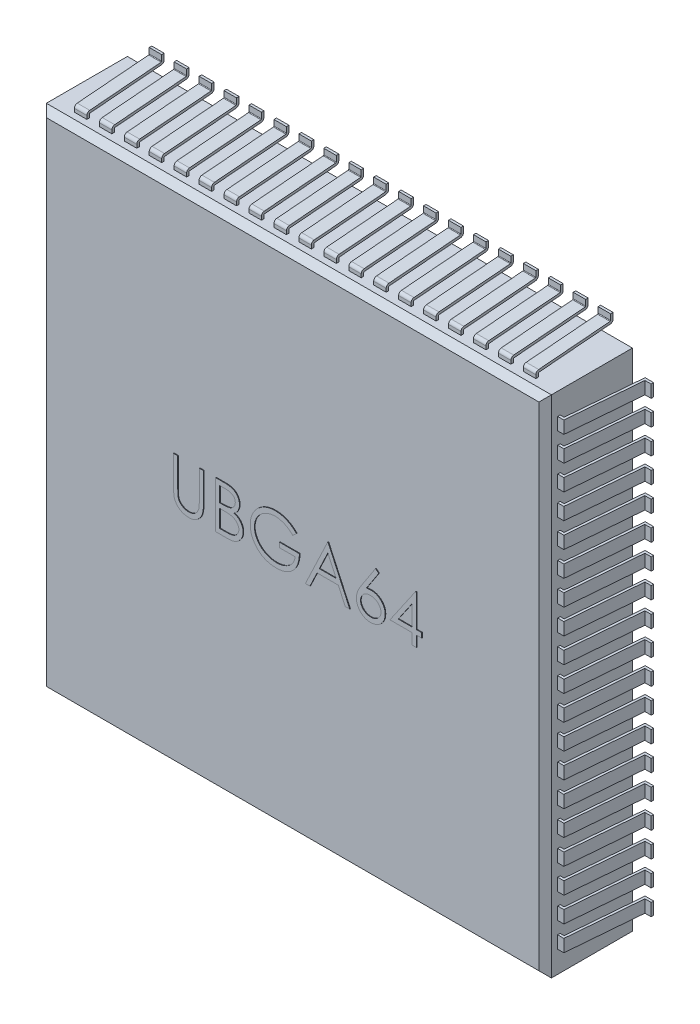
from build123d import *

# Parameters (mm, degrees)
COMPONENT_OUTLINE_W    = 8.1
COMPONENT_OUTLINE_H    = 8.1
EXTRUDE1_DEPTH         = 1.4
EXTRUDE_THIN1_DEPTH    = 0.1
LPATTERN1_COUNT        = 10
LPATTERN1_PITCH        = 0.4
LPATTERN1_COUNT_DIR2   = 10
LPATTERN1_PITCH_DIR2   = 0.4
MIRROR1_COPY_1_DEPTH   = 0.1
MIRROR1_COPY_2_DEPTH   = 0.1
MIRROR1_COPY_3_DEPTH   = 0.1
MIRROR1_COPY_4_DEPTH   = 0.1
MIRROR1_COPY_5_DEPTH   = 0.1
MIRROR1_COPY_6_DEPTH   = 0.1
MIRROR1_COPY_7_DEPTH   = 0.1
MIRROR1_COPY_8_DEPTH   = 0.1
MIRROR1_COPY_9_DEPTH   = 0.1
MIRROR1_COPY_10_DEPTH  = 0.1
MIRROR1_COPY_11_DEPTH  = 0.1
MIRROR1_COPY_12_DEPTH  = 0.1
MIRROR1_COPY_13_DEPTH  = 0.1
MIRROR1_COPY_14_DEPTH  = 0.1
MIRROR1_COPY_15_DEPTH  = 0.1
MIRROR1_COPY_16_DEPTH  = 0.1
MIRROR1_COPY_17_DEPTH  = 0.1
MIRROR1_COPY_18_DEPTH  = 0.1
MIRROR1_COPY_19_DEPTH  = 0.1
MIRROR1_COPY_20_DEPTH  = 0.1
MIRROR1_COPY_21_DEPTH  = 0.1
MIRROR1_COPY_22_DEPTH  = 0.1
MIRROR1_COPY_23_DEPTH  = 0.1
MIRROR1_COPY_24_DEPTH  = 0.1
MIRROR1_COPY_25_DEPTH  = 0.1
MIRROR1_COPY_26_DEPTH  = 0.1
MIRROR1_COPY_27_DEPTH  = 0.1
MIRROR1_COPY_28_DEPTH  = 0.1
MIRROR1_COPY_29_DEPTH  = 0.1
MIRROR1_COPY_30_DEPTH  = 0.1
MIRROR1_COPY_31_DEPTH  = 0.1
MIRROR1_COPY_32_DEPTH  = 0.1
MIRROR1_COPY_33_DEPTH  = 0.1
MIRROR1_COPY_34_DEPTH  = 0.1
MIRROR1_COPY_35_DEPTH  = 0.1
MIRROR1_COPY_36_DEPTH  = 0.1
MIRROR1_COPY_37_DEPTH  = 0.1
MIRROR1_COPY_38_DEPTH  = 0.1
MIRROR1_COPY_39_DEPTH  = 0.1
MIRROR1_COPY_40_DEPTH  = 0.1
MIRROR1_COPY_41_DEPTH  = 0.1
MIRROR1_COPY_42_DEPTH  = 0.1
MIRROR1_COPY_43_DEPTH  = 0.1
MIRROR1_COPY_44_DEPTH  = 0.1
MIRROR1_COPY_45_DEPTH  = 0.1
MIRROR1_COPY_46_DEPTH  = 0.1
MIRROR1_COPY_47_DEPTH  = 0.1
MIRROR1_COPY_48_DEPTH  = 0.1
MIRROR1_COPY_49_DEPTH  = 0.1
MIRROR1_COPY_50_DEPTH  = 0.1
MIRROR1_COPY_51_DEPTH  = 0.1
MIRROR1_COPY_52_DEPTH  = 0.1
MIRROR1_COPY_53_DEPTH  = 0.1
MIRROR1_COPY_54_DEPTH  = 0.1
MIRROR1_COPY_55_DEPTH  = 0.1
MIRROR1_COPY_56_DEPTH  = 0.1
MIRROR1_COPY_57_DEPTH  = 0.1
MIRROR1_COPY_58_DEPTH  = 0.1
MIRROR1_COPY_59_DEPTH  = 0.1
MIRROR1_COPY_60_DEPTH  = 0.1
MIRROR1_COPY_61_DEPTH  = 0.1
MIRROR1_COPY_62_DEPTH  = 0.1
MIRROR1_COPY_63_DEPTH  = 0.1
MIRROR1_COPY_64_DEPTH  = 0.1
MIRROR1_COPY_65_DEPTH  = 0.1
MIRROR1_COPY_66_DEPTH  = 0.1
MIRROR1_COPY_67_DEPTH  = 0.1
MIRROR1_COPY_68_DEPTH  = 0.1
MIRROR1_COPY_69_DEPTH  = 0.1
MIRROR1_COPY_70_DEPTH  = 0.1
MIRROR1_COPY_71_DEPTH  = 0.1
MIRROR1_COPY_72_DEPTH  = 0.1
MIRROR1_COPY_73_DEPTH  = 0.1
MIRROR1_COPY_74_DEPTH  = 0.1
MIRROR1_COPY_75_DEPTH  = 0.1
MIRROR1_COPY_76_DEPTH  = 0.1
MIRROR1_COPY_77_DEPTH  = 0.1
MIRROR1_COPY_78_DEPTH  = 0.1
MIRROR1_COPY_79_DEPTH  = 0.1
MIRROR1_COPY_80_DEPTH  = 0.1
MIRROR1_COPY_81_DEPTH  = 0.1
MIRROR1_COPY_82_DEPTH  = 0.1
MIRROR1_COPY_83_DEPTH  = 0.1
MIRROR1_COPY_84_DEPTH  = 0.1
MIRROR1_COPY_85_DEPTH  = 0.1
MIRROR1_COPY_86_DEPTH  = 0.1
MIRROR1_COPY_87_DEPTH  = 0.1
MIRROR1_COPY_88_DEPTH  = 0.1
MIRROR1_COPY_89_DEPTH  = 0.1
MIRROR1_COPY_90_DEPTH  = 0.1
MIRROR1_COPY_91_DEPTH  = 0.1
MIRROR1_COPY_92_DEPTH  = 0.1
MIRROR1_COPY_93_DEPTH  = 0.1
MIRROR1_COPY_94_DEPTH  = 0.1
MIRROR1_COPY_95_DEPTH  = 0.1
MIRROR1_COPY_96_DEPTH  = 0.1
MIRROR1_COPY_97_DEPTH  = 0.1
MIRROR1_COPY_98_DEPTH  = 0.1
MIRROR1_COPY_99_DEPTH  = 0.1
EXTRUDE_THIN2_DEPTH    = 0.1
LPATTERN2_COUNT        = 10
LPATTERN2_PITCH        = 0.4
LPATTERN2_COUNT_DIR2   = 10
LPATTERN2_PITCH_DIR2   = 0.4
MIRROR2_COPY_1_DEPTH   = 0.1
MIRROR2_COPY_2_DEPTH   = 0.1
MIRROR2_COPY_3_DEPTH   = 0.1
MIRROR2_COPY_4_DEPTH   = 0.1
MIRROR2_COPY_5_DEPTH   = 0.1
MIRROR2_COPY_6_DEPTH   = 0.1
MIRROR2_COPY_7_DEPTH   = 0.1
MIRROR2_COPY_8_DEPTH   = 0.1
MIRROR2_COPY_9_DEPTH   = 0.1
MIRROR2_COPY_10_DEPTH  = 0.1
MIRROR2_COPY_11_DEPTH  = 0.1
MIRROR2_COPY_12_DEPTH  = 0.1
MIRROR2_COPY_13_DEPTH  = 0.1
MIRROR2_COPY_14_DEPTH  = 0.1
MIRROR2_COPY_15_DEPTH  = 0.1
MIRROR2_COPY_16_DEPTH  = 0.1
MIRROR2_COPY_17_DEPTH  = 0.1
MIRROR2_COPY_18_DEPTH  = 0.1
MIRROR2_COPY_19_DEPTH  = 0.1
MIRROR2_COPY_20_DEPTH  = 0.1
MIRROR2_COPY_21_DEPTH  = 0.1
MIRROR2_COPY_22_DEPTH  = 0.1
MIRROR2_COPY_23_DEPTH  = 0.1
MIRROR2_COPY_24_DEPTH  = 0.1
MIRROR2_COPY_25_DEPTH  = 0.1
MIRROR2_COPY_26_DEPTH  = 0.1
MIRROR2_COPY_27_DEPTH  = 0.1
MIRROR2_COPY_28_DEPTH  = 0.1
MIRROR2_COPY_29_DEPTH  = 0.1
MIRROR2_COPY_30_DEPTH  = 0.1
MIRROR2_COPY_31_DEPTH  = 0.1
MIRROR2_COPY_32_DEPTH  = 0.1
MIRROR2_COPY_33_DEPTH  = 0.1
MIRROR2_COPY_34_DEPTH  = 0.1
MIRROR2_COPY_35_DEPTH  = 0.1
MIRROR2_COPY_36_DEPTH  = 0.1
MIRROR2_COPY_37_DEPTH  = 0.1
MIRROR2_COPY_38_DEPTH  = 0.1
MIRROR2_COPY_39_DEPTH  = 0.1
MIRROR2_COPY_40_DEPTH  = 0.1
MIRROR2_COPY_41_DEPTH  = 0.1
MIRROR2_COPY_42_DEPTH  = 0.1
MIRROR2_COPY_43_DEPTH  = 0.1
MIRROR2_COPY_44_DEPTH  = 0.1
MIRROR2_COPY_45_DEPTH  = 0.1
MIRROR2_COPY_46_DEPTH  = 0.1
MIRROR2_COPY_47_DEPTH  = 0.1
MIRROR2_COPY_48_DEPTH  = 0.1
MIRROR2_COPY_49_DEPTH  = 0.1
MIRROR2_COPY_50_DEPTH  = 0.1
MIRROR2_COPY_51_DEPTH  = 0.1
MIRROR2_COPY_52_DEPTH  = 0.1
MIRROR2_COPY_53_DEPTH  = 0.1
MIRROR2_COPY_54_DEPTH  = 0.1
MIRROR2_COPY_55_DEPTH  = 0.1
MIRROR2_COPY_56_DEPTH  = 0.1
MIRROR2_COPY_57_DEPTH  = 0.1
MIRROR2_COPY_58_DEPTH  = 0.1
MIRROR2_COPY_59_DEPTH  = 0.1
MIRROR2_COPY_60_DEPTH  = 0.1
MIRROR2_COPY_61_DEPTH  = 0.1
MIRROR2_COPY_62_DEPTH  = 0.1
MIRROR2_COPY_63_DEPTH  = 0.1
MIRROR2_COPY_64_DEPTH  = 0.1
MIRROR2_COPY_65_DEPTH  = 0.1
MIRROR2_COPY_66_DEPTH  = 0.1
MIRROR2_COPY_67_DEPTH  = 0.1
MIRROR2_COPY_68_DEPTH  = 0.1
MIRROR2_COPY_69_DEPTH  = 0.1
MIRROR2_COPY_70_DEPTH  = 0.1
MIRROR2_COPY_71_DEPTH  = 0.1
MIRROR2_COPY_72_DEPTH  = 0.1
MIRROR2_COPY_73_DEPTH  = 0.1
MIRROR2_COPY_74_DEPTH  = 0.1
MIRROR2_COPY_75_DEPTH  = 0.1
MIRROR2_COPY_76_DEPTH  = 0.1
MIRROR2_COPY_77_DEPTH  = 0.1
MIRROR2_COPY_78_DEPTH  = 0.1
MIRROR2_COPY_79_DEPTH  = 0.1
MIRROR2_COPY_80_DEPTH  = 0.1
MIRROR2_COPY_81_DEPTH  = 0.1
MIRROR2_COPY_82_DEPTH  = 0.1
MIRROR2_COPY_83_DEPTH  = 0.1
MIRROR2_COPY_84_DEPTH  = 0.1
MIRROR2_COPY_85_DEPTH  = 0.1
MIRROR2_COPY_86_DEPTH  = 0.1
MIRROR2_COPY_87_DEPTH  = 0.1
MIRROR2_COPY_88_DEPTH  = 0.1
MIRROR2_COPY_89_DEPTH  = 0.1
MIRROR2_COPY_90_DEPTH  = 0.1
MIRROR2_COPY_91_DEPTH  = 0.1
MIRROR2_COPY_92_DEPTH  = 0.1
MIRROR2_COPY_93_DEPTH  = 0.1
MIRROR2_COPY_94_DEPTH  = 0.1
MIRROR2_COPY_95_DEPTH  = 0.1
MIRROR2_COPY_96_DEPTH  = 0.1
MIRROR2_COPY_97_DEPTH  = 0.1
MIRROR2_COPY_98_DEPTH  = 0.1
MIRROR2_COPY_99_DEPTH  = 0.1
MIRROR2_COPY_100_DEPTH = 0.1
CHAMFER1_SIZE          = 0.1
EXTRUDE2_DEPTH         = 0.01


with BuildPart() as part:
    # COMPONENT_OUTLINE → Extrude1 (new body)
    with BuildSketch(Plane.XY):
        Rectangle(COMPONENT_OUTLINE_W, COMPONENT_OUTLINE_H)
    extrude(amount=EXTRUDE1_DEPTH)

    # Sketch1 → Extrude-Thin1 (add, symmetric)
    with BuildSketch(Plane(origin=(0, 0, 0), x_dir=(0, 0, -1), z_dir=(1, 0, 0))):
        with BuildLine():
            Line((-1.2, 4.05), (-1.2, 4.103993356))
            ThreePointArc((-1.2, 4.103993356), (-1.186794114, 4.13784883), (-1.154152274, 4.153820644))
            Line((-1.154152274, 4.153820644), (-0.009169545, 4.249235871))
            ThreePointArc((-0.009169545, 4.249235871), (-0.002641177, 4.252430234), (0, 4.259201329))
            Line((0, 4.259201329), (0, 4.35))
            Line((0, 4.35), (0.04, 4.35))
            Line((0.04, 4.35), (0.04, 4.259201329))
            ThreePointArc((0.04, 4.259201329), (0.026794114, 4.225345854), (-0.005847726, 4.209374041))
            Line((-0.005847726, 4.209374041), (-1.150830455, 4.113958814))
            ThreePointArc((-1.150830455, 4.113958814), (-1.157358823, 4.110764451), (-1.16, 4.103993356))
            Line((-1.16, 4.103993356), (-1.16, 4.05))
            Line((-1.16, 4.05), (-1.2, 4.05))
        make_face()
    extrude_thin1 = extrude(amount=EXTRUDE_THIN1_DEPTH, both=True)

    # LPattern1: Extrude-Thin1 10 × 10
    with Locations(*[Vector(-1, 0, 0) * (i * LPATTERN1_PITCH) + Vector(1, 0, 0) * (j * LPATTERN1_PITCH_DIR2) for i in range(LPATTERN1_COUNT) for j in range(LPATTERN1_COUNT_DIR2) if (i, j) != (0, 0)]):
        add(extrude_thin1)

    # Mirror1: Extrude-Thin1 across plane
    add(extrude_thin1.mirror(Plane.ZX))

    # Mirror1 copy 1 sketch → Mirror1 copy 1 (add, symmetric)
    with BuildSketch(Plane(origin=(0.4, 0, 0), x_dir=(0, 0, -1), z_dir=(1, 0, 0))):
        with BuildLine():
            Line((-1.2, -4.05), (-1.2, -4.103993356))
            ThreePointArc((-1.2, -4.103993356), (-1.186794114, -4.13784883), (-1.154152274, -4.153820644))
            Line((-1.154152274, -4.153820644), (-0.009169545, -4.249235871))
            ThreePointArc((-0.009169545, -4.249235871), (-0.002641177, -4.252430234), (0, -4.259201329))
            Line((0, -4.259201329), (0, -4.35))
            Line((0, -4.35), (0.04, -4.35))
            Line((0.04, -4.35), (0.04, -4.259201329))
            ThreePointArc((0.04, -4.259201329), (0.026794114, -4.225345854), (-0.005847726, -4.209374041))
            Line((-0.005847726, -4.209374041), (-1.150830455, -4.113958814))
            ThreePointArc((-1.150830455, -4.113958814), (-1.157358823, -4.110764451), (-1.16, -4.103993356))
            Line((-1.16, -4.103993356), (-1.16, -4.05))
            Line((-1.16, -4.05), (-1.2, -4.05))
        make_face()
    extrude(amount=MIRROR1_COPY_1_DEPTH, both=True)

    # Mirror1 copy 2 sketch → Mirror1 copy 2 (add, symmetric)
    with BuildSketch(Plane(origin=(0.8, 0, 0), x_dir=(0, 0, -1), z_dir=(1, 0, 0))):
        with BuildLine():
            Line((-1.2, -4.05), (-1.2, -4.103993356))
            ThreePointArc((-1.2, -4.103993356), (-1.186794114, -4.13784883), (-1.154152274, -4.153820644))
            Line((-1.154152274, -4.153820644), (-0.009169545, -4.249235871))
            ThreePointArc((-0.009169545, -4.249235871), (-0.002641177, -4.252430234), (0, -4.259201329))
            Line((0, -4.259201329), (0, -4.35))
            Line((0, -4.35), (0.04, -4.35))
            Line((0.04, -4.35), (0.04, -4.259201329))
            ThreePointArc((0.04, -4.259201329), (0.026794114, -4.225345854), (-0.005847726, -4.209374041))
            Line((-0.005847726, -4.209374041), (-1.150830455, -4.113958814))
            ThreePointArc((-1.150830455, -4.113958814), (-1.157358823, -4.110764451), (-1.16, -4.103993356))
            Line((-1.16, -4.103993356), (-1.16, -4.05))
            Line((-1.16, -4.05), (-1.2, -4.05))
        make_face()
    extrude(amount=MIRROR1_COPY_2_DEPTH, both=True)

    # Mirror1 copy 3 sketch → Mirror1 copy 3 (add, symmetric)
    with BuildSketch(Plane(origin=(1.2, 0, 0), x_dir=(0, 0, -1), z_dir=(1, 0, 0))):
        with BuildLine():
            Line((-1.2, -4.05), (-1.2, -4.103993356))
            ThreePointArc((-1.2, -4.103993356), (-1.186794114, -4.13784883), (-1.154152274, -4.153820644))
            Line((-1.154152274, -4.153820644), (-0.009169545, -4.249235871))
            ThreePointArc((-0.009169545, -4.249235871), (-0.002641177, -4.252430234), (0, -4.259201329))
            Line((0, -4.259201329), (0, -4.35))
            Line((0, -4.35), (0.04, -4.35))
            Line((0.04, -4.35), (0.04, -4.259201329))
            ThreePointArc((0.04, -4.259201329), (0.026794114, -4.225345854), (-0.005847726, -4.209374041))
            Line((-0.005847726, -4.209374041), (-1.150830455, -4.113958814))
            ThreePointArc((-1.150830455, -4.113958814), (-1.157358823, -4.110764451), (-1.16, -4.103993356))
            Line((-1.16, -4.103993356), (-1.16, -4.05))
            Line((-1.16, -4.05), (-1.2, -4.05))
        make_face()
    extrude(amount=MIRROR1_COPY_3_DEPTH, both=True)

    # Mirror1 copy 4 sketch → Mirror1 copy 4 (add, symmetric)
    with BuildSketch(Plane(origin=(1.6, 0, 0), x_dir=(0, 0, -1), z_dir=(1, 0, 0))):
        with BuildLine():
            Line((-1.2, -4.05), (-1.2, -4.103993356))
            ThreePointArc((-1.2, -4.103993356), (-1.186794114, -4.13784883), (-1.154152274, -4.153820644))
            Line((-1.154152274, -4.153820644), (-0.009169545, -4.249235871))
            ThreePointArc((-0.009169545, -4.249235871), (-0.002641177, -4.252430234), (0, -4.259201329))
            Line((0, -4.259201329), (0, -4.35))
            Line((0, -4.35), (0.04, -4.35))
            Line((0.04, -4.35), (0.04, -4.259201329))
            ThreePointArc((0.04, -4.259201329), (0.026794114, -4.225345854), (-0.005847726, -4.209374041))
            Line((-0.005847726, -4.209374041), (-1.150830455, -4.113958814))
            ThreePointArc((-1.150830455, -4.113958814), (-1.157358823, -4.110764451), (-1.16, -4.103993356))
            Line((-1.16, -4.103993356), (-1.16, -4.05))
            Line((-1.16, -4.05), (-1.2, -4.05))
        make_face()
    extrude(amount=MIRROR1_COPY_4_DEPTH, both=True)

    # Mirror1 copy 5 sketch → Mirror1 copy 5 (add, symmetric)
    with BuildSketch(Plane(origin=(2, 0, 0), x_dir=(0, 0, -1), z_dir=(1, 0, 0))):
        with BuildLine():
            Line((-1.2, -4.05), (-1.2, -4.103993356))
            ThreePointArc((-1.2, -4.103993356), (-1.186794114, -4.13784883), (-1.154152274, -4.153820644))
            Line((-1.154152274, -4.153820644), (-0.009169545, -4.249235871))
            ThreePointArc((-0.009169545, -4.249235871), (-0.002641177, -4.252430234), (0, -4.259201329))
            Line((0, -4.259201329), (0, -4.35))
            Line((0, -4.35), (0.04, -4.35))
            Line((0.04, -4.35), (0.04, -4.259201329))
            ThreePointArc((0.04, -4.259201329), (0.026794114, -4.225345854), (-0.005847726, -4.209374041))
            Line((-0.005847726, -4.209374041), (-1.150830455, -4.113958814))
            ThreePointArc((-1.150830455, -4.113958814), (-1.157358823, -4.110764451), (-1.16, -4.103993356))
            Line((-1.16, -4.103993356), (-1.16, -4.05))
            Line((-1.16, -4.05), (-1.2, -4.05))
        make_face()
    extrude(amount=MIRROR1_COPY_5_DEPTH, both=True)

    # Mirror1 copy 6 sketch → Mirror1 copy 6 (add, symmetric)
    with BuildSketch(Plane(origin=(2.4, 0, 0), x_dir=(0, 0, -1), z_dir=(1, 0, 0))):
        with BuildLine():
            Line((-1.2, -4.05), (-1.2, -4.103993356))
            ThreePointArc((-1.2, -4.103993356), (-1.186794114, -4.13784883), (-1.154152274, -4.153820644))
            Line((-1.154152274, -4.153820644), (-0.009169545, -4.249235871))
            ThreePointArc((-0.009169545, -4.249235871), (-0.002641177, -4.252430234), (0, -4.259201329))
            Line((0, -4.259201329), (0, -4.35))
            Line((0, -4.35), (0.04, -4.35))
            Line((0.04, -4.35), (0.04, -4.259201329))
            ThreePointArc((0.04, -4.259201329), (0.026794114, -4.225345854), (-0.005847726, -4.209374041))
            Line((-0.005847726, -4.209374041), (-1.150830455, -4.113958814))
            ThreePointArc((-1.150830455, -4.113958814), (-1.157358823, -4.110764451), (-1.16, -4.103993356))
            Line((-1.16, -4.103993356), (-1.16, -4.05))
            Line((-1.16, -4.05), (-1.2, -4.05))
        make_face()
    extrude(amount=MIRROR1_COPY_6_DEPTH, both=True)

    # Mirror1 copy 7 sketch → Mirror1 copy 7 (add, symmetric)
    with BuildSketch(Plane(origin=(2.8, 0, 0), x_dir=(0, 0, -1), z_dir=(1, 0, 0))):
        with BuildLine():
            Line((-1.2, -4.05), (-1.2, -4.103993356))
            ThreePointArc((-1.2, -4.103993356), (-1.186794114, -4.13784883), (-1.154152274, -4.153820644))
            Line((-1.154152274, -4.153820644), (-0.009169545, -4.249235871))
            ThreePointArc((-0.009169545, -4.249235871), (-0.002641177, -4.252430234), (0, -4.259201329))
            Line((0, -4.259201329), (0, -4.35))
            Line((0, -4.35), (0.04, -4.35))
            Line((0.04, -4.35), (0.04, -4.259201329))
            ThreePointArc((0.04, -4.259201329), (0.026794114, -4.225345854), (-0.005847726, -4.209374041))
            Line((-0.005847726, -4.209374041), (-1.150830455, -4.113958814))
            ThreePointArc((-1.150830455, -4.113958814), (-1.157358823, -4.110764451), (-1.16, -4.103993356))
            Line((-1.16, -4.103993356), (-1.16, -4.05))
            Line((-1.16, -4.05), (-1.2, -4.05))
        make_face()
    extrude(amount=MIRROR1_COPY_7_DEPTH, both=True)

    # Mirror1 copy 8 sketch → Mirror1 copy 8 (add, symmetric)
    with BuildSketch(Plane(origin=(3.2, 0, 0), x_dir=(0, 0, -1), z_dir=(1, 0, 0))):
        with BuildLine():
            Line((-1.2, -4.05), (-1.2, -4.103993356))
            ThreePointArc((-1.2, -4.103993356), (-1.186794114, -4.13784883), (-1.154152274, -4.153820644))
            Line((-1.154152274, -4.153820644), (-0.009169545, -4.249235871))
            ThreePointArc((-0.009169545, -4.249235871), (-0.002641177, -4.252430234), (0, -4.259201329))
            Line((0, -4.259201329), (0, -4.35))
            Line((0, -4.35), (0.04, -4.35))
            Line((0.04, -4.35), (0.04, -4.259201329))
            ThreePointArc((0.04, -4.259201329), (0.026794114, -4.225345854), (-0.005847726, -4.209374041))
            Line((-0.005847726, -4.209374041), (-1.150830455, -4.113958814))
            ThreePointArc((-1.150830455, -4.113958814), (-1.157358823, -4.110764451), (-1.16, -4.103993356))
            Line((-1.16, -4.103993356), (-1.16, -4.05))
            Line((-1.16, -4.05), (-1.2, -4.05))
        make_face()
    extrude(amount=MIRROR1_COPY_8_DEPTH, both=True)

    # Mirror1 copy 9 sketch → Mirror1 copy 9 (add, symmetric)
    with BuildSketch(Plane(origin=(3.6, 0, 0), x_dir=(0, 0, -1), z_dir=(1, 0, 0))):
        with BuildLine():
            Line((-1.2, -4.05), (-1.2, -4.103993356))
            ThreePointArc((-1.2, -4.103993356), (-1.186794114, -4.13784883), (-1.154152274, -4.153820644))
            Line((-1.154152274, -4.153820644), (-0.009169545, -4.249235871))
            ThreePointArc((-0.009169545, -4.249235871), (-0.002641177, -4.252430234), (0, -4.259201329))
            Line((0, -4.259201329), (0, -4.35))
            Line((0, -4.35), (0.04, -4.35))
            Line((0.04, -4.35), (0.04, -4.259201329))
            ThreePointArc((0.04, -4.259201329), (0.026794114, -4.225345854), (-0.005847726, -4.209374041))
            Line((-0.005847726, -4.209374041), (-1.150830455, -4.113958814))
            ThreePointArc((-1.150830455, -4.113958814), (-1.157358823, -4.110764451), (-1.16, -4.103993356))
            Line((-1.16, -4.103993356), (-1.16, -4.05))
            Line((-1.16, -4.05), (-1.2, -4.05))
        make_face()
    extrude(amount=MIRROR1_COPY_9_DEPTH, both=True)

    # Mirror1 copy 10 sketch → Mirror1 copy 10 (add, symmetric)
    with BuildSketch(Plane(origin=(-0.4, 0, 0), x_dir=(0, 0, -1), z_dir=(1, 0, 0))):
        with BuildLine():
            Line((-1.2, -4.05), (-1.2, -4.103993356))
            ThreePointArc((-1.2, -4.103993356), (-1.186794114, -4.13784883), (-1.154152274, -4.153820644))
            Line((-1.154152274, -4.153820644), (-0.009169545, -4.249235871))
            ThreePointArc((-0.009169545, -4.249235871), (-0.002641177, -4.252430234), (0, -4.259201329))
            Line((0, -4.259201329), (0, -4.35))
            Line((0, -4.35), (0.04, -4.35))
            Line((0.04, -4.35), (0.04, -4.259201329))
            ThreePointArc((0.04, -4.259201329), (0.026794114, -4.225345854), (-0.005847726, -4.209374041))
            Line((-0.005847726, -4.209374041), (-1.150830455, -4.113958814))
            ThreePointArc((-1.150830455, -4.113958814), (-1.157358823, -4.110764451), (-1.16, -4.103993356))
            Line((-1.16, -4.103993356), (-1.16, -4.05))
            Line((-1.16, -4.05), (-1.2, -4.05))
        make_face()
    extrude(amount=MIRROR1_COPY_10_DEPTH, both=True)

    # Mirror1 copy 11 sketch → Mirror1 copy 11 (add, symmetric)
    with BuildSketch(Plane(origin=(0, 0, 0), x_dir=(0, 0, -1), z_dir=(1, 0, 0))):
        with BuildLine():
            Line((-1.2, -4.05), (-1.2, -4.103993356))
            ThreePointArc((-1.2, -4.103993356), (-1.186794114, -4.13784883), (-1.154152274, -4.153820644))
            Line((-1.154152274, -4.153820644), (-0.009169545, -4.249235871))
            ThreePointArc((-0.009169545, -4.249235871), (-0.002641177, -4.252430234), (0, -4.259201329))
            Line((0, -4.259201329), (0, -4.35))
            Line((0, -4.35), (0.04, -4.35))
            Line((0.04, -4.35), (0.04, -4.259201329))
            ThreePointArc((0.04, -4.259201329), (0.026794114, -4.225345854), (-0.005847726, -4.209374041))
            Line((-0.005847726, -4.209374041), (-1.150830455, -4.113958814))
            ThreePointArc((-1.150830455, -4.113958814), (-1.157358823, -4.110764451), (-1.16, -4.103993356))
            Line((-1.16, -4.103993356), (-1.16, -4.05))
            Line((-1.16, -4.05), (-1.2, -4.05))
        make_face()
    extrude(amount=MIRROR1_COPY_11_DEPTH, both=True)

    # Mirror1 copy 12 sketch → Mirror1 copy 12 (add, symmetric)
    with BuildSketch(Plane(origin=(0.4, 0, 0), x_dir=(0, 0, -1), z_dir=(1, 0, 0))):
        with BuildLine():
            Line((-1.2, -4.05), (-1.2, -4.103993356))
            ThreePointArc((-1.2, -4.103993356), (-1.186794114, -4.13784883), (-1.154152274, -4.153820644))
            Line((-1.154152274, -4.153820644), (-0.009169545, -4.249235871))
            ThreePointArc((-0.009169545, -4.249235871), (-0.002641177, -4.252430234), (0, -4.259201329))
            Line((0, -4.259201329), (0, -4.35))
            Line((0, -4.35), (0.04, -4.35))
            Line((0.04, -4.35), (0.04, -4.259201329))
            ThreePointArc((0.04, -4.259201329), (0.026794114, -4.225345854), (-0.005847726, -4.209374041))
            Line((-0.005847726, -4.209374041), (-1.150830455, -4.113958814))
            ThreePointArc((-1.150830455, -4.113958814), (-1.157358823, -4.110764451), (-1.16, -4.103993356))
            Line((-1.16, -4.103993356), (-1.16, -4.05))
            Line((-1.16, -4.05), (-1.2, -4.05))
        make_face()
    extrude(amount=MIRROR1_COPY_12_DEPTH, both=True)

    # Mirror1 copy 13 sketch → Mirror1 copy 13 (add, symmetric)
    with BuildSketch(Plane(origin=(0.8, 0, 0), x_dir=(0, 0, -1), z_dir=(1, 0, 0))):
        with BuildLine():
            Line((-1.2, -4.05), (-1.2, -4.103993356))
            ThreePointArc((-1.2, -4.103993356), (-1.186794114, -4.13784883), (-1.154152274, -4.153820644))
            Line((-1.154152274, -4.153820644), (-0.009169545, -4.249235871))
            ThreePointArc((-0.009169545, -4.249235871), (-0.002641177, -4.252430234), (0, -4.259201329))
            Line((0, -4.259201329), (0, -4.35))
            Line((0, -4.35), (0.04, -4.35))
            Line((0.04, -4.35), (0.04, -4.259201329))
            ThreePointArc((0.04, -4.259201329), (0.026794114, -4.225345854), (-0.005847726, -4.209374041))
            Line((-0.005847726, -4.209374041), (-1.150830455, -4.113958814))
            ThreePointArc((-1.150830455, -4.113958814), (-1.157358823, -4.110764451), (-1.16, -4.103993356))
            Line((-1.16, -4.103993356), (-1.16, -4.05))
            Line((-1.16, -4.05), (-1.2, -4.05))
        make_face()
    extrude(amount=MIRROR1_COPY_13_DEPTH, both=True)

    # Mirror1 copy 14 sketch → Mirror1 copy 14 (add, symmetric)
    with BuildSketch(Plane(origin=(1.2, 0, 0), x_dir=(0, 0, -1), z_dir=(1, 0, 0))):
        with BuildLine():
            Line((-1.2, -4.05), (-1.2, -4.103993356))
            ThreePointArc((-1.2, -4.103993356), (-1.186794114, -4.13784883), (-1.154152274, -4.153820644))
            Line((-1.154152274, -4.153820644), (-0.009169545, -4.249235871))
            ThreePointArc((-0.009169545, -4.249235871), (-0.002641177, -4.252430234), (0, -4.259201329))
            Line((0, -4.259201329), (0, -4.35))
            Line((0, -4.35), (0.04, -4.35))
            Line((0.04, -4.35), (0.04, -4.259201329))
            ThreePointArc((0.04, -4.259201329), (0.026794114, -4.225345854), (-0.005847726, -4.209374041))
            Line((-0.005847726, -4.209374041), (-1.150830455, -4.113958814))
            ThreePointArc((-1.150830455, -4.113958814), (-1.157358823, -4.110764451), (-1.16, -4.103993356))
            Line((-1.16, -4.103993356), (-1.16, -4.05))
            Line((-1.16, -4.05), (-1.2, -4.05))
        make_face()
    extrude(amount=MIRROR1_COPY_14_DEPTH, both=True)

    # Mirror1 copy 15 sketch → Mirror1 copy 15 (add, symmetric)
    with BuildSketch(Plane(origin=(1.6, 0, 0), x_dir=(0, 0, -1), z_dir=(1, 0, 0))):
        with BuildLine():
            Line((-1.2, -4.05), (-1.2, -4.103993356))
            ThreePointArc((-1.2, -4.103993356), (-1.186794114, -4.13784883), (-1.154152274, -4.153820644))
            Line((-1.154152274, -4.153820644), (-0.009169545, -4.249235871))
            ThreePointArc((-0.009169545, -4.249235871), (-0.002641177, -4.252430234), (0, -4.259201329))
            Line((0, -4.259201329), (0, -4.35))
            Line((0, -4.35), (0.04, -4.35))
            Line((0.04, -4.35), (0.04, -4.259201329))
            ThreePointArc((0.04, -4.259201329), (0.026794114, -4.225345854), (-0.005847726, -4.209374041))
            Line((-0.005847726, -4.209374041), (-1.150830455, -4.113958814))
            ThreePointArc((-1.150830455, -4.113958814), (-1.157358823, -4.110764451), (-1.16, -4.103993356))
            Line((-1.16, -4.103993356), (-1.16, -4.05))
            Line((-1.16, -4.05), (-1.2, -4.05))
        make_face()
    extrude(amount=MIRROR1_COPY_15_DEPTH, both=True)

    # Mirror1 copy 16 sketch → Mirror1 copy 16 (add, symmetric)
    with BuildSketch(Plane(origin=(2, 0, 0), x_dir=(0, 0, -1), z_dir=(1, 0, 0))):
        with BuildLine():
            Line((-1.2, -4.05), (-1.2, -4.103993356))
            ThreePointArc((-1.2, -4.103993356), (-1.186794114, -4.13784883), (-1.154152274, -4.153820644))
            Line((-1.154152274, -4.153820644), (-0.009169545, -4.249235871))
            ThreePointArc((-0.009169545, -4.249235871), (-0.002641177, -4.252430234), (0, -4.259201329))
            Line((0, -4.259201329), (0, -4.35))
            Line((0, -4.35), (0.04, -4.35))
            Line((0.04, -4.35), (0.04, -4.259201329))
            ThreePointArc((0.04, -4.259201329), (0.026794114, -4.225345854), (-0.005847726, -4.209374041))
            Line((-0.005847726, -4.209374041), (-1.150830455, -4.113958814))
            ThreePointArc((-1.150830455, -4.113958814), (-1.157358823, -4.110764451), (-1.16, -4.103993356))
            Line((-1.16, -4.103993356), (-1.16, -4.05))
            Line((-1.16, -4.05), (-1.2, -4.05))
        make_face()
    extrude(amount=MIRROR1_COPY_16_DEPTH, both=True)

    # Mirror1 copy 17 sketch → Mirror1 copy 17 (add, symmetric)
    with BuildSketch(Plane(origin=(2.4, 0, 0), x_dir=(0, 0, -1), z_dir=(1, 0, 0))):
        with BuildLine():
            Line((-1.2, -4.05), (-1.2, -4.103993356))
            ThreePointArc((-1.2, -4.103993356), (-1.186794114, -4.13784883), (-1.154152274, -4.153820644))
            Line((-1.154152274, -4.153820644), (-0.009169545, -4.249235871))
            ThreePointArc((-0.009169545, -4.249235871), (-0.002641177, -4.252430234), (0, -4.259201329))
            Line((0, -4.259201329), (0, -4.35))
            Line((0, -4.35), (0.04, -4.35))
            Line((0.04, -4.35), (0.04, -4.259201329))
            ThreePointArc((0.04, -4.259201329), (0.026794114, -4.225345854), (-0.005847726, -4.209374041))
            Line((-0.005847726, -4.209374041), (-1.150830455, -4.113958814))
            ThreePointArc((-1.150830455, -4.113958814), (-1.157358823, -4.110764451), (-1.16, -4.103993356))
            Line((-1.16, -4.103993356), (-1.16, -4.05))
            Line((-1.16, -4.05), (-1.2, -4.05))
        make_face()
    extrude(amount=MIRROR1_COPY_17_DEPTH, both=True)

    # Mirror1 copy 18 sketch → Mirror1 copy 18 (add, symmetric)
    with BuildSketch(Plane(origin=(2.8, 0, 0), x_dir=(0, 0, -1), z_dir=(1, 0, 0))):
        with BuildLine():
            Line((-1.2, -4.05), (-1.2, -4.103993356))
            ThreePointArc((-1.2, -4.103993356), (-1.186794114, -4.13784883), (-1.154152274, -4.153820644))
            Line((-1.154152274, -4.153820644), (-0.009169545, -4.249235871))
            ThreePointArc((-0.009169545, -4.249235871), (-0.002641177, -4.252430234), (0, -4.259201329))
            Line((0, -4.259201329), (0, -4.35))
            Line((0, -4.35), (0.04, -4.35))
            Line((0.04, -4.35), (0.04, -4.259201329))
            ThreePointArc((0.04, -4.259201329), (0.026794114, -4.225345854), (-0.005847726, -4.209374041))
            Line((-0.005847726, -4.209374041), (-1.150830455, -4.113958814))
            ThreePointArc((-1.150830455, -4.113958814), (-1.157358823, -4.110764451), (-1.16, -4.103993356))
            Line((-1.16, -4.103993356), (-1.16, -4.05))
            Line((-1.16, -4.05), (-1.2, -4.05))
        make_face()
    extrude(amount=MIRROR1_COPY_18_DEPTH, both=True)

    # Mirror1 copy 19 sketch → Mirror1 copy 19 (add, symmetric)
    with BuildSketch(Plane(origin=(3.2, 0, 0), x_dir=(0, 0, -1), z_dir=(1, 0, 0))):
        with BuildLine():
            Line((-1.2, -4.05), (-1.2, -4.103993356))
            ThreePointArc((-1.2, -4.103993356), (-1.186794114, -4.13784883), (-1.154152274, -4.153820644))
            Line((-1.154152274, -4.153820644), (-0.009169545, -4.249235871))
            ThreePointArc((-0.009169545, -4.249235871), (-0.002641177, -4.252430234), (0, -4.259201329))
            Line((0, -4.259201329), (0, -4.35))
            Line((0, -4.35), (0.04, -4.35))
            Line((0.04, -4.35), (0.04, -4.259201329))
            ThreePointArc((0.04, -4.259201329), (0.026794114, -4.225345854), (-0.005847726, -4.209374041))
            Line((-0.005847726, -4.209374041), (-1.150830455, -4.113958814))
            ThreePointArc((-1.150830455, -4.113958814), (-1.157358823, -4.110764451), (-1.16, -4.103993356))
            Line((-1.16, -4.103993356), (-1.16, -4.05))
            Line((-1.16, -4.05), (-1.2, -4.05))
        make_face()
    extrude(amount=MIRROR1_COPY_19_DEPTH, both=True)

    # Mirror1 copy 20 sketch → Mirror1 copy 20 (add, symmetric)
    with BuildSketch(Plane(origin=(-0.8, 0, 0), x_dir=(0, 0, -1), z_dir=(1, 0, 0))):
        with BuildLine():
            Line((-1.2, -4.05), (-1.2, -4.103993356))
            ThreePointArc((-1.2, -4.103993356), (-1.186794114, -4.13784883), (-1.154152274, -4.153820644))
            Line((-1.154152274, -4.153820644), (-0.009169545, -4.249235871))
            ThreePointArc((-0.009169545, -4.249235871), (-0.002641177, -4.252430234), (0, -4.259201329))
            Line((0, -4.259201329), (0, -4.35))
            Line((0, -4.35), (0.04, -4.35))
            Line((0.04, -4.35), (0.04, -4.259201329))
            ThreePointArc((0.04, -4.259201329), (0.026794114, -4.225345854), (-0.005847726, -4.209374041))
            Line((-0.005847726, -4.209374041), (-1.150830455, -4.113958814))
            ThreePointArc((-1.150830455, -4.113958814), (-1.157358823, -4.110764451), (-1.16, -4.103993356))
            Line((-1.16, -4.103993356), (-1.16, -4.05))
            Line((-1.16, -4.05), (-1.2, -4.05))
        make_face()
    extrude(amount=MIRROR1_COPY_20_DEPTH, both=True)

    # Mirror1 copy 21 sketch → Mirror1 copy 21 (add, symmetric)
    with BuildSketch(Plane(origin=(-0.4, 0, 0), x_dir=(0, 0, -1), z_dir=(1, 0, 0))):
        with BuildLine():
            Line((-1.2, -4.05), (-1.2, -4.103993356))
            ThreePointArc((-1.2, -4.103993356), (-1.186794114, -4.13784883), (-1.154152274, -4.153820644))
            Line((-1.154152274, -4.153820644), (-0.009169545, -4.249235871))
            ThreePointArc((-0.009169545, -4.249235871), (-0.002641177, -4.252430234), (0, -4.259201329))
            Line((0, -4.259201329), (0, -4.35))
            Line((0, -4.35), (0.04, -4.35))
            Line((0.04, -4.35), (0.04, -4.259201329))
            ThreePointArc((0.04, -4.259201329), (0.026794114, -4.225345854), (-0.005847726, -4.209374041))
            Line((-0.005847726, -4.209374041), (-1.150830455, -4.113958814))
            ThreePointArc((-1.150830455, -4.113958814), (-1.157358823, -4.110764451), (-1.16, -4.103993356))
            Line((-1.16, -4.103993356), (-1.16, -4.05))
            Line((-1.16, -4.05), (-1.2, -4.05))
        make_face()
    extrude(amount=MIRROR1_COPY_21_DEPTH, both=True)

    # Mirror1 copy 22 sketch → Mirror1 copy 22 (add, symmetric)
    with BuildSketch(Plane(origin=(0, 0, 0), x_dir=(0, 0, -1), z_dir=(1, 0, 0))):
        with BuildLine():
            Line((-1.2, -4.05), (-1.2, -4.103993356))
            ThreePointArc((-1.2, -4.103993356), (-1.186794114, -4.13784883), (-1.154152274, -4.153820644))
            Line((-1.154152274, -4.153820644), (-0.009169545, -4.249235871))
            ThreePointArc((-0.009169545, -4.249235871), (-0.002641177, -4.252430234), (0, -4.259201329))
            Line((0, -4.259201329), (0, -4.35))
            Line((0, -4.35), (0.04, -4.35))
            Line((0.04, -4.35), (0.04, -4.259201329))
            ThreePointArc((0.04, -4.259201329), (0.026794114, -4.225345854), (-0.005847726, -4.209374041))
            Line((-0.005847726, -4.209374041), (-1.150830455, -4.113958814))
            ThreePointArc((-1.150830455, -4.113958814), (-1.157358823, -4.110764451), (-1.16, -4.103993356))
            Line((-1.16, -4.103993356), (-1.16, -4.05))
            Line((-1.16, -4.05), (-1.2, -4.05))
        make_face()
    extrude(amount=MIRROR1_COPY_22_DEPTH, both=True)

    # Mirror1 copy 23 sketch → Mirror1 copy 23 (add, symmetric)
    with BuildSketch(Plane(origin=(0.4, 0, 0), x_dir=(0, 0, -1), z_dir=(1, 0, 0))):
        with BuildLine():
            Line((-1.2, -4.05), (-1.2, -4.103993356))
            ThreePointArc((-1.2, -4.103993356), (-1.186794114, -4.13784883), (-1.154152274, -4.153820644))
            Line((-1.154152274, -4.153820644), (-0.009169545, -4.249235871))
            ThreePointArc((-0.009169545, -4.249235871), (-0.002641177, -4.252430234), (0, -4.259201329))
            Line((0, -4.259201329), (0, -4.35))
            Line((0, -4.35), (0.04, -4.35))
            Line((0.04, -4.35), (0.04, -4.259201329))
            ThreePointArc((0.04, -4.259201329), (0.026794114, -4.225345854), (-0.005847726, -4.209374041))
            Line((-0.005847726, -4.209374041), (-1.150830455, -4.113958814))
            ThreePointArc((-1.150830455, -4.113958814), (-1.157358823, -4.110764451), (-1.16, -4.103993356))
            Line((-1.16, -4.103993356), (-1.16, -4.05))
            Line((-1.16, -4.05), (-1.2, -4.05))
        make_face()
    extrude(amount=MIRROR1_COPY_23_DEPTH, both=True)

    # Mirror1 copy 24 sketch → Mirror1 copy 24 (add, symmetric)
    with BuildSketch(Plane(origin=(0.8, 0, 0), x_dir=(0, 0, -1), z_dir=(1, 0, 0))):
        with BuildLine():
            Line((-1.2, -4.05), (-1.2, -4.103993356))
            ThreePointArc((-1.2, -4.103993356), (-1.186794114, -4.13784883), (-1.154152274, -4.153820644))
            Line((-1.154152274, -4.153820644), (-0.009169545, -4.249235871))
            ThreePointArc((-0.009169545, -4.249235871), (-0.002641177, -4.252430234), (0, -4.259201329))
            Line((0, -4.259201329), (0, -4.35))
            Line((0, -4.35), (0.04, -4.35))
            Line((0.04, -4.35), (0.04, -4.259201329))
            ThreePointArc((0.04, -4.259201329), (0.026794114, -4.225345854), (-0.005847726, -4.209374041))
            Line((-0.005847726, -4.209374041), (-1.150830455, -4.113958814))
            ThreePointArc((-1.150830455, -4.113958814), (-1.157358823, -4.110764451), (-1.16, -4.103993356))
            Line((-1.16, -4.103993356), (-1.16, -4.05))
            Line((-1.16, -4.05), (-1.2, -4.05))
        make_face()
    extrude(amount=MIRROR1_COPY_24_DEPTH, both=True)

    # Mirror1 copy 25 sketch → Mirror1 copy 25 (add, symmetric)
    with BuildSketch(Plane(origin=(1.2, 0, 0), x_dir=(0, 0, -1), z_dir=(1, 0, 0))):
        with BuildLine():
            Line((-1.2, -4.05), (-1.2, -4.103993356))
            ThreePointArc((-1.2, -4.103993356), (-1.186794114, -4.13784883), (-1.154152274, -4.153820644))
            Line((-1.154152274, -4.153820644), (-0.009169545, -4.249235871))
            ThreePointArc((-0.009169545, -4.249235871), (-0.002641177, -4.252430234), (0, -4.259201329))
            Line((0, -4.259201329), (0, -4.35))
            Line((0, -4.35), (0.04, -4.35))
            Line((0.04, -4.35), (0.04, -4.259201329))
            ThreePointArc((0.04, -4.259201329), (0.026794114, -4.225345854), (-0.005847726, -4.209374041))
            Line((-0.005847726, -4.209374041), (-1.150830455, -4.113958814))
            ThreePointArc((-1.150830455, -4.113958814), (-1.157358823, -4.110764451), (-1.16, -4.103993356))
            Line((-1.16, -4.103993356), (-1.16, -4.05))
            Line((-1.16, -4.05), (-1.2, -4.05))
        make_face()
    extrude(amount=MIRROR1_COPY_25_DEPTH, both=True)

    # Mirror1 copy 26 sketch → Mirror1 copy 26 (add, symmetric)
    with BuildSketch(Plane(origin=(1.6, 0, 0), x_dir=(0, 0, -1), z_dir=(1, 0, 0))):
        with BuildLine():
            Line((-1.2, -4.05), (-1.2, -4.103993356))
            ThreePointArc((-1.2, -4.103993356), (-1.186794114, -4.13784883), (-1.154152274, -4.153820644))
            Line((-1.154152274, -4.153820644), (-0.009169545, -4.249235871))
            ThreePointArc((-0.009169545, -4.249235871), (-0.002641177, -4.252430234), (0, -4.259201329))
            Line((0, -4.259201329), (0, -4.35))
            Line((0, -4.35), (0.04, -4.35))
            Line((0.04, -4.35), (0.04, -4.259201329))
            ThreePointArc((0.04, -4.259201329), (0.026794114, -4.225345854), (-0.005847726, -4.209374041))
            Line((-0.005847726, -4.209374041), (-1.150830455, -4.113958814))
            ThreePointArc((-1.150830455, -4.113958814), (-1.157358823, -4.110764451), (-1.16, -4.103993356))
            Line((-1.16, -4.103993356), (-1.16, -4.05))
            Line((-1.16, -4.05), (-1.2, -4.05))
        make_face()
    extrude(amount=MIRROR1_COPY_26_DEPTH, both=True)

    # Mirror1 copy 27 sketch → Mirror1 copy 27 (add, symmetric)
    with BuildSketch(Plane(origin=(2, 0, 0), x_dir=(0, 0, -1), z_dir=(1, 0, 0))):
        with BuildLine():
            Line((-1.2, -4.05), (-1.2, -4.103993356))
            ThreePointArc((-1.2, -4.103993356), (-1.186794114, -4.13784883), (-1.154152274, -4.153820644))
            Line((-1.154152274, -4.153820644), (-0.009169545, -4.249235871))
            ThreePointArc((-0.009169545, -4.249235871), (-0.002641177, -4.252430234), (0, -4.259201329))
            Line((0, -4.259201329), (0, -4.35))
            Line((0, -4.35), (0.04, -4.35))
            Line((0.04, -4.35), (0.04, -4.259201329))
            ThreePointArc((0.04, -4.259201329), (0.026794114, -4.225345854), (-0.005847726, -4.209374041))
            Line((-0.005847726, -4.209374041), (-1.150830455, -4.113958814))
            ThreePointArc((-1.150830455, -4.113958814), (-1.157358823, -4.110764451), (-1.16, -4.103993356))
            Line((-1.16, -4.103993356), (-1.16, -4.05))
            Line((-1.16, -4.05), (-1.2, -4.05))
        make_face()
    extrude(amount=MIRROR1_COPY_27_DEPTH, both=True)

    # Mirror1 copy 28 sketch → Mirror1 copy 28 (add, symmetric)
    with BuildSketch(Plane(origin=(2.4, 0, 0), x_dir=(0, 0, -1), z_dir=(1, 0, 0))):
        with BuildLine():
            Line((-1.2, -4.05), (-1.2, -4.103993356))
            ThreePointArc((-1.2, -4.103993356), (-1.186794114, -4.13784883), (-1.154152274, -4.153820644))
            Line((-1.154152274, -4.153820644), (-0.009169545, -4.249235871))
            ThreePointArc((-0.009169545, -4.249235871), (-0.002641177, -4.252430234), (0, -4.259201329))
            Line((0, -4.259201329), (0, -4.35))
            Line((0, -4.35), (0.04, -4.35))
            Line((0.04, -4.35), (0.04, -4.259201329))
            ThreePointArc((0.04, -4.259201329), (0.026794114, -4.225345854), (-0.005847726, -4.209374041))
            Line((-0.005847726, -4.209374041), (-1.150830455, -4.113958814))
            ThreePointArc((-1.150830455, -4.113958814), (-1.157358823, -4.110764451), (-1.16, -4.103993356))
            Line((-1.16, -4.103993356), (-1.16, -4.05))
            Line((-1.16, -4.05), (-1.2, -4.05))
        make_face()
    extrude(amount=MIRROR1_COPY_28_DEPTH, both=True)

    # Mirror1 copy 29 sketch → Mirror1 copy 29 (add, symmetric)
    with BuildSketch(Plane(origin=(2.8, 0, 0), x_dir=(0, 0, -1), z_dir=(1, 0, 0))):
        with BuildLine():
            Line((-1.2, -4.05), (-1.2, -4.103993356))
            ThreePointArc((-1.2, -4.103993356), (-1.186794114, -4.13784883), (-1.154152274, -4.153820644))
            Line((-1.154152274, -4.153820644), (-0.009169545, -4.249235871))
            ThreePointArc((-0.009169545, -4.249235871), (-0.002641177, -4.252430234), (0, -4.259201329))
            Line((0, -4.259201329), (0, -4.35))
            Line((0, -4.35), (0.04, -4.35))
            Line((0.04, -4.35), (0.04, -4.259201329))
            ThreePointArc((0.04, -4.259201329), (0.026794114, -4.225345854), (-0.005847726, -4.209374041))
            Line((-0.005847726, -4.209374041), (-1.150830455, -4.113958814))
            ThreePointArc((-1.150830455, -4.113958814), (-1.157358823, -4.110764451), (-1.16, -4.103993356))
            Line((-1.16, -4.103993356), (-1.16, -4.05))
            Line((-1.16, -4.05), (-1.2, -4.05))
        make_face()
    extrude(amount=MIRROR1_COPY_29_DEPTH, both=True)

    # Mirror1 copy 30 sketch → Mirror1 copy 30 (add, symmetric)
    with BuildSketch(Plane(origin=(-1.2, 0, 0), x_dir=(0, 0, -1), z_dir=(1, 0, 0))):
        with BuildLine():
            Line((-1.2, -4.05), (-1.2, -4.103993356))
            ThreePointArc((-1.2, -4.103993356), (-1.186794114, -4.13784883), (-1.154152274, -4.153820644))
            Line((-1.154152274, -4.153820644), (-0.009169545, -4.249235871))
            ThreePointArc((-0.009169545, -4.249235871), (-0.002641177, -4.252430234), (0, -4.259201329))
            Line((0, -4.259201329), (0, -4.35))
            Line((0, -4.35), (0.04, -4.35))
            Line((0.04, -4.35), (0.04, -4.259201329))
            ThreePointArc((0.04, -4.259201329), (0.026794114, -4.225345854), (-0.005847726, -4.209374041))
            Line((-0.005847726, -4.209374041), (-1.150830455, -4.113958814))
            ThreePointArc((-1.150830455, -4.113958814), (-1.157358823, -4.110764451), (-1.16, -4.103993356))
            Line((-1.16, -4.103993356), (-1.16, -4.05))
            Line((-1.16, -4.05), (-1.2, -4.05))
        make_face()
    extrude(amount=MIRROR1_COPY_30_DEPTH, both=True)

    # Mirror1 copy 31 sketch → Mirror1 copy 31 (add, symmetric)
    with BuildSketch(Plane(origin=(-0.8, 0, 0), x_dir=(0, 0, -1), z_dir=(1, 0, 0))):
        with BuildLine():
            Line((-1.2, -4.05), (-1.2, -4.103993356))
            ThreePointArc((-1.2, -4.103993356), (-1.186794114, -4.13784883), (-1.154152274, -4.153820644))
            Line((-1.154152274, -4.153820644), (-0.009169545, -4.249235871))
            ThreePointArc((-0.009169545, -4.249235871), (-0.002641177, -4.252430234), (0, -4.259201329))
            Line((0, -4.259201329), (0, -4.35))
            Line((0, -4.35), (0.04, -4.35))
            Line((0.04, -4.35), (0.04, -4.259201329))
            ThreePointArc((0.04, -4.259201329), (0.026794114, -4.225345854), (-0.005847726, -4.209374041))
            Line((-0.005847726, -4.209374041), (-1.150830455, -4.113958814))
            ThreePointArc((-1.150830455, -4.113958814), (-1.157358823, -4.110764451), (-1.16, -4.103993356))
            Line((-1.16, -4.103993356), (-1.16, -4.05))
            Line((-1.16, -4.05), (-1.2, -4.05))
        make_face()
    extrude(amount=MIRROR1_COPY_31_DEPTH, both=True)

    # Mirror1 copy 32 sketch → Mirror1 copy 32 (add, symmetric)
    with BuildSketch(Plane(origin=(-0.4, 0, 0), x_dir=(0, 0, -1), z_dir=(1, 0, 0))):
        with BuildLine():
            Line((-1.2, -4.05), (-1.2, -4.103993356))
            ThreePointArc((-1.2, -4.103993356), (-1.186794114, -4.13784883), (-1.154152274, -4.153820644))
            Line((-1.154152274, -4.153820644), (-0.009169545, -4.249235871))
            ThreePointArc((-0.009169545, -4.249235871), (-0.002641177, -4.252430234), (0, -4.259201329))
            Line((0, -4.259201329), (0, -4.35))
            Line((0, -4.35), (0.04, -4.35))
            Line((0.04, -4.35), (0.04, -4.259201329))
            ThreePointArc((0.04, -4.259201329), (0.026794114, -4.225345854), (-0.005847726, -4.209374041))
            Line((-0.005847726, -4.209374041), (-1.150830455, -4.113958814))
            ThreePointArc((-1.150830455, -4.113958814), (-1.157358823, -4.110764451), (-1.16, -4.103993356))
            Line((-1.16, -4.103993356), (-1.16, -4.05))
            Line((-1.16, -4.05), (-1.2, -4.05))
        make_face()
    extrude(amount=MIRROR1_COPY_32_DEPTH, both=True)

    # Mirror1 copy 33 sketch → Mirror1 copy 33 (add, symmetric)
    with BuildSketch(Plane(origin=(0, 0, 0), x_dir=(0, 0, -1), z_dir=(1, 0, 0))):
        with BuildLine():
            Line((-1.2, -4.05), (-1.2, -4.103993356))
            ThreePointArc((-1.2, -4.103993356), (-1.186794114, -4.13784883), (-1.154152274, -4.153820644))
            Line((-1.154152274, -4.153820644), (-0.009169545, -4.249235871))
            ThreePointArc((-0.009169545, -4.249235871), (-0.002641177, -4.252430234), (0, -4.259201329))
            Line((0, -4.259201329), (0, -4.35))
            Line((0, -4.35), (0.04, -4.35))
            Line((0.04, -4.35), (0.04, -4.259201329))
            ThreePointArc((0.04, -4.259201329), (0.026794114, -4.225345854), (-0.005847726, -4.209374041))
            Line((-0.005847726, -4.209374041), (-1.150830455, -4.113958814))
            ThreePointArc((-1.150830455, -4.113958814), (-1.157358823, -4.110764451), (-1.16, -4.103993356))
            Line((-1.16, -4.103993356), (-1.16, -4.05))
            Line((-1.16, -4.05), (-1.2, -4.05))
        make_face()
    extrude(amount=MIRROR1_COPY_33_DEPTH, both=True)

    # Mirror1 copy 34 sketch → Mirror1 copy 34 (add, symmetric)
    with BuildSketch(Plane(origin=(0.4, 0, 0), x_dir=(0, 0, -1), z_dir=(1, 0, 0))):
        with BuildLine():
            Line((-1.2, -4.05), (-1.2, -4.103993356))
            ThreePointArc((-1.2, -4.103993356), (-1.186794114, -4.13784883), (-1.154152274, -4.153820644))
            Line((-1.154152274, -4.153820644), (-0.009169545, -4.249235871))
            ThreePointArc((-0.009169545, -4.249235871), (-0.002641177, -4.252430234), (0, -4.259201329))
            Line((0, -4.259201329), (0, -4.35))
            Line((0, -4.35), (0.04, -4.35))
            Line((0.04, -4.35), (0.04, -4.259201329))
            ThreePointArc((0.04, -4.259201329), (0.026794114, -4.225345854), (-0.005847726, -4.209374041))
            Line((-0.005847726, -4.209374041), (-1.150830455, -4.113958814))
            ThreePointArc((-1.150830455, -4.113958814), (-1.157358823, -4.110764451), (-1.16, -4.103993356))
            Line((-1.16, -4.103993356), (-1.16, -4.05))
            Line((-1.16, -4.05), (-1.2, -4.05))
        make_face()
    extrude(amount=MIRROR1_COPY_34_DEPTH, both=True)

    # Mirror1 copy 35 sketch → Mirror1 copy 35 (add, symmetric)
    with BuildSketch(Plane(origin=(0.8, 0, 0), x_dir=(0, 0, -1), z_dir=(1, 0, 0))):
        with BuildLine():
            Line((-1.2, -4.05), (-1.2, -4.103993356))
            ThreePointArc((-1.2, -4.103993356), (-1.186794114, -4.13784883), (-1.154152274, -4.153820644))
            Line((-1.154152274, -4.153820644), (-0.009169545, -4.249235871))
            ThreePointArc((-0.009169545, -4.249235871), (-0.002641177, -4.252430234), (0, -4.259201329))
            Line((0, -4.259201329), (0, -4.35))
            Line((0, -4.35), (0.04, -4.35))
            Line((0.04, -4.35), (0.04, -4.259201329))
            ThreePointArc((0.04, -4.259201329), (0.026794114, -4.225345854), (-0.005847726, -4.209374041))
            Line((-0.005847726, -4.209374041), (-1.150830455, -4.113958814))
            ThreePointArc((-1.150830455, -4.113958814), (-1.157358823, -4.110764451), (-1.16, -4.103993356))
            Line((-1.16, -4.103993356), (-1.16, -4.05))
            Line((-1.16, -4.05), (-1.2, -4.05))
        make_face()
    extrude(amount=MIRROR1_COPY_35_DEPTH, both=True)

    # Mirror1 copy 36 sketch → Mirror1 copy 36 (add, symmetric)
    with BuildSketch(Plane(origin=(1.2, 0, 0), x_dir=(0, 0, -1), z_dir=(1, 0, 0))):
        with BuildLine():
            Line((-1.2, -4.05), (-1.2, -4.103993356))
            ThreePointArc((-1.2, -4.103993356), (-1.186794114, -4.13784883), (-1.154152274, -4.153820644))
            Line((-1.154152274, -4.153820644), (-0.009169545, -4.249235871))
            ThreePointArc((-0.009169545, -4.249235871), (-0.002641177, -4.252430234), (0, -4.259201329))
            Line((0, -4.259201329), (0, -4.35))
            Line((0, -4.35), (0.04, -4.35))
            Line((0.04, -4.35), (0.04, -4.259201329))
            ThreePointArc((0.04, -4.259201329), (0.026794114, -4.225345854), (-0.005847726, -4.209374041))
            Line((-0.005847726, -4.209374041), (-1.150830455, -4.113958814))
            ThreePointArc((-1.150830455, -4.113958814), (-1.157358823, -4.110764451), (-1.16, -4.103993356))
            Line((-1.16, -4.103993356), (-1.16, -4.05))
            Line((-1.16, -4.05), (-1.2, -4.05))
        make_face()
    extrude(amount=MIRROR1_COPY_36_DEPTH, both=True)

    # Mirror1 copy 37 sketch → Mirror1 copy 37 (add, symmetric)
    with BuildSketch(Plane(origin=(1.6, 0, 0), x_dir=(0, 0, -1), z_dir=(1, 0, 0))):
        with BuildLine():
            Line((-1.2, -4.05), (-1.2, -4.103993356))
            ThreePointArc((-1.2, -4.103993356), (-1.186794114, -4.13784883), (-1.154152274, -4.153820644))
            Line((-1.154152274, -4.153820644), (-0.009169545, -4.249235871))
            ThreePointArc((-0.009169545, -4.249235871), (-0.002641177, -4.252430234), (0, -4.259201329))
            Line((0, -4.259201329), (0, -4.35))
            Line((0, -4.35), (0.04, -4.35))
            Line((0.04, -4.35), (0.04, -4.259201329))
            ThreePointArc((0.04, -4.259201329), (0.026794114, -4.225345854), (-0.005847726, -4.209374041))
            Line((-0.005847726, -4.209374041), (-1.150830455, -4.113958814))
            ThreePointArc((-1.150830455, -4.113958814), (-1.157358823, -4.110764451), (-1.16, -4.103993356))
            Line((-1.16, -4.103993356), (-1.16, -4.05))
            Line((-1.16, -4.05), (-1.2, -4.05))
        make_face()
    extrude(amount=MIRROR1_COPY_37_DEPTH, both=True)

    # Mirror1 copy 38 sketch → Mirror1 copy 38 (add, symmetric)
    with BuildSketch(Plane(origin=(2, 0, 0), x_dir=(0, 0, -1), z_dir=(1, 0, 0))):
        with BuildLine():
            Line((-1.2, -4.05), (-1.2, -4.103993356))
            ThreePointArc((-1.2, -4.103993356), (-1.186794114, -4.13784883), (-1.154152274, -4.153820644))
            Line((-1.154152274, -4.153820644), (-0.009169545, -4.249235871))
            ThreePointArc((-0.009169545, -4.249235871), (-0.002641177, -4.252430234), (0, -4.259201329))
            Line((0, -4.259201329), (0, -4.35))
            Line((0, -4.35), (0.04, -4.35))
            Line((0.04, -4.35), (0.04, -4.259201329))
            ThreePointArc((0.04, -4.259201329), (0.026794114, -4.225345854), (-0.005847726, -4.209374041))
            Line((-0.005847726, -4.209374041), (-1.150830455, -4.113958814))
            ThreePointArc((-1.150830455, -4.113958814), (-1.157358823, -4.110764451), (-1.16, -4.103993356))
            Line((-1.16, -4.103993356), (-1.16, -4.05))
            Line((-1.16, -4.05), (-1.2, -4.05))
        make_face()
    extrude(amount=MIRROR1_COPY_38_DEPTH, both=True)

    # Mirror1 copy 39 sketch → Mirror1 copy 39 (add, symmetric)
    with BuildSketch(Plane(origin=(2.4, 0, 0), x_dir=(0, 0, -1), z_dir=(1, 0, 0))):
        with BuildLine():
            Line((-1.2, -4.05), (-1.2, -4.103993356))
            ThreePointArc((-1.2, -4.103993356), (-1.186794114, -4.13784883), (-1.154152274, -4.153820644))
            Line((-1.154152274, -4.153820644), (-0.009169545, -4.249235871))
            ThreePointArc((-0.009169545, -4.249235871), (-0.002641177, -4.252430234), (0, -4.259201329))
            Line((0, -4.259201329), (0, -4.35))
            Line((0, -4.35), (0.04, -4.35))
            Line((0.04, -4.35), (0.04, -4.259201329))
            ThreePointArc((0.04, -4.259201329), (0.026794114, -4.225345854), (-0.005847726, -4.209374041))
            Line((-0.005847726, -4.209374041), (-1.150830455, -4.113958814))
            ThreePointArc((-1.150830455, -4.113958814), (-1.157358823, -4.110764451), (-1.16, -4.103993356))
            Line((-1.16, -4.103993356), (-1.16, -4.05))
            Line((-1.16, -4.05), (-1.2, -4.05))
        make_face()
    extrude(amount=MIRROR1_COPY_39_DEPTH, both=True)

    # Mirror1 copy 40 sketch → Mirror1 copy 40 (add, symmetric)
    with BuildSketch(Plane(origin=(-1.6, 0, 0), x_dir=(0, 0, -1), z_dir=(1, 0, 0))):
        with BuildLine():
            Line((-1.2, -4.05), (-1.2, -4.103993356))
            ThreePointArc((-1.2, -4.103993356), (-1.186794114, -4.13784883), (-1.154152274, -4.153820644))
            Line((-1.154152274, -4.153820644), (-0.009169545, -4.249235871))
            ThreePointArc((-0.009169545, -4.249235871), (-0.002641177, -4.252430234), (0, -4.259201329))
            Line((0, -4.259201329), (0, -4.35))
            Line((0, -4.35), (0.04, -4.35))
            Line((0.04, -4.35), (0.04, -4.259201329))
            ThreePointArc((0.04, -4.259201329), (0.026794114, -4.225345854), (-0.005847726, -4.209374041))
            Line((-0.005847726, -4.209374041), (-1.150830455, -4.113958814))
            ThreePointArc((-1.150830455, -4.113958814), (-1.157358823, -4.110764451), (-1.16, -4.103993356))
            Line((-1.16, -4.103993356), (-1.16, -4.05))
            Line((-1.16, -4.05), (-1.2, -4.05))
        make_face()
    extrude(amount=MIRROR1_COPY_40_DEPTH, both=True)

    # Mirror1 copy 41 sketch → Mirror1 copy 41 (add, symmetric)
    with BuildSketch(Plane(origin=(-1.2, 0, 0), x_dir=(0, 0, -1), z_dir=(1, 0, 0))):
        with BuildLine():
            Line((-1.2, -4.05), (-1.2, -4.103993356))
            ThreePointArc((-1.2, -4.103993356), (-1.186794114, -4.13784883), (-1.154152274, -4.153820644))
            Line((-1.154152274, -4.153820644), (-0.009169545, -4.249235871))
            ThreePointArc((-0.009169545, -4.249235871), (-0.002641177, -4.252430234), (0, -4.259201329))
            Line((0, -4.259201329), (0, -4.35))
            Line((0, -4.35), (0.04, -4.35))
            Line((0.04, -4.35), (0.04, -4.259201329))
            ThreePointArc((0.04, -4.259201329), (0.026794114, -4.225345854), (-0.005847726, -4.209374041))
            Line((-0.005847726, -4.209374041), (-1.150830455, -4.113958814))
            ThreePointArc((-1.150830455, -4.113958814), (-1.157358823, -4.110764451), (-1.16, -4.103993356))
            Line((-1.16, -4.103993356), (-1.16, -4.05))
            Line((-1.16, -4.05), (-1.2, -4.05))
        make_face()
    extrude(amount=MIRROR1_COPY_41_DEPTH, both=True)

    # Mirror1 copy 42 sketch → Mirror1 copy 42 (add, symmetric)
    with BuildSketch(Plane(origin=(-0.8, 0, 0), x_dir=(0, 0, -1), z_dir=(1, 0, 0))):
        with BuildLine():
            Line((-1.2, -4.05), (-1.2, -4.103993356))
            ThreePointArc((-1.2, -4.103993356), (-1.186794114, -4.13784883), (-1.154152274, -4.153820644))
            Line((-1.154152274, -4.153820644), (-0.009169545, -4.249235871))
            ThreePointArc((-0.009169545, -4.249235871), (-0.002641177, -4.252430234), (0, -4.259201329))
            Line((0, -4.259201329), (0, -4.35))
            Line((0, -4.35), (0.04, -4.35))
            Line((0.04, -4.35), (0.04, -4.259201329))
            ThreePointArc((0.04, -4.259201329), (0.026794114, -4.225345854), (-0.005847726, -4.209374041))
            Line((-0.005847726, -4.209374041), (-1.150830455, -4.113958814))
            ThreePointArc((-1.150830455, -4.113958814), (-1.157358823, -4.110764451), (-1.16, -4.103993356))
            Line((-1.16, -4.103993356), (-1.16, -4.05))
            Line((-1.16, -4.05), (-1.2, -4.05))
        make_face()
    extrude(amount=MIRROR1_COPY_42_DEPTH, both=True)

    # Mirror1 copy 43 sketch → Mirror1 copy 43 (add, symmetric)
    with BuildSketch(Plane(origin=(-0.4, 0, 0), x_dir=(0, 0, -1), z_dir=(1, 0, 0))):
        with BuildLine():
            Line((-1.2, -4.05), (-1.2, -4.103993356))
            ThreePointArc((-1.2, -4.103993356), (-1.186794114, -4.13784883), (-1.154152274, -4.153820644))
            Line((-1.154152274, -4.153820644), (-0.009169545, -4.249235871))
            ThreePointArc((-0.009169545, -4.249235871), (-0.002641177, -4.252430234), (0, -4.259201329))
            Line((0, -4.259201329), (0, -4.35))
            Line((0, -4.35), (0.04, -4.35))
            Line((0.04, -4.35), (0.04, -4.259201329))
            ThreePointArc((0.04, -4.259201329), (0.026794114, -4.225345854), (-0.005847726, -4.209374041))
            Line((-0.005847726, -4.209374041), (-1.150830455, -4.113958814))
            ThreePointArc((-1.150830455, -4.113958814), (-1.157358823, -4.110764451), (-1.16, -4.103993356))
            Line((-1.16, -4.103993356), (-1.16, -4.05))
            Line((-1.16, -4.05), (-1.2, -4.05))
        make_face()
    extrude(amount=MIRROR1_COPY_43_DEPTH, both=True)

    # Mirror1 copy 44 sketch → Mirror1 copy 44 (add, symmetric)
    with BuildSketch(Plane(origin=(0, 0, 0), x_dir=(0, 0, -1), z_dir=(1, 0, 0))):
        with BuildLine():
            Line((-1.2, -4.05), (-1.2, -4.103993356))
            ThreePointArc((-1.2, -4.103993356), (-1.186794114, -4.13784883), (-1.154152274, -4.153820644))
            Line((-1.154152274, -4.153820644), (-0.009169545, -4.249235871))
            ThreePointArc((-0.009169545, -4.249235871), (-0.002641177, -4.252430234), (0, -4.259201329))
            Line((0, -4.259201329), (0, -4.35))
            Line((0, -4.35), (0.04, -4.35))
            Line((0.04, -4.35), (0.04, -4.259201329))
            ThreePointArc((0.04, -4.259201329), (0.026794114, -4.225345854), (-0.005847726, -4.209374041))
            Line((-0.005847726, -4.209374041), (-1.150830455, -4.113958814))
            ThreePointArc((-1.150830455, -4.113958814), (-1.157358823, -4.110764451), (-1.16, -4.103993356))
            Line((-1.16, -4.103993356), (-1.16, -4.05))
            Line((-1.16, -4.05), (-1.2, -4.05))
        make_face()
    extrude(amount=MIRROR1_COPY_44_DEPTH, both=True)

    # Mirror1 copy 45 sketch → Mirror1 copy 45 (add, symmetric)
    with BuildSketch(Plane(origin=(0.4, 0, 0), x_dir=(0, 0, -1), z_dir=(1, 0, 0))):
        with BuildLine():
            Line((-1.2, -4.05), (-1.2, -4.103993356))
            ThreePointArc((-1.2, -4.103993356), (-1.186794114, -4.13784883), (-1.154152274, -4.153820644))
            Line((-1.154152274, -4.153820644), (-0.009169545, -4.249235871))
            ThreePointArc((-0.009169545, -4.249235871), (-0.002641177, -4.252430234), (0, -4.259201329))
            Line((0, -4.259201329), (0, -4.35))
            Line((0, -4.35), (0.04, -4.35))
            Line((0.04, -4.35), (0.04, -4.259201329))
            ThreePointArc((0.04, -4.259201329), (0.026794114, -4.225345854), (-0.005847726, -4.209374041))
            Line((-0.005847726, -4.209374041), (-1.150830455, -4.113958814))
            ThreePointArc((-1.150830455, -4.113958814), (-1.157358823, -4.110764451), (-1.16, -4.103993356))
            Line((-1.16, -4.103993356), (-1.16, -4.05))
            Line((-1.16, -4.05), (-1.2, -4.05))
        make_face()
    extrude(amount=MIRROR1_COPY_45_DEPTH, both=True)

    # Mirror1 copy 46 sketch → Mirror1 copy 46 (add, symmetric)
    with BuildSketch(Plane(origin=(0.8, 0, 0), x_dir=(0, 0, -1), z_dir=(1, 0, 0))):
        with BuildLine():
            Line((-1.2, -4.05), (-1.2, -4.103993356))
            ThreePointArc((-1.2, -4.103993356), (-1.186794114, -4.13784883), (-1.154152274, -4.153820644))
            Line((-1.154152274, -4.153820644), (-0.009169545, -4.249235871))
            ThreePointArc((-0.009169545, -4.249235871), (-0.002641177, -4.252430234), (0, -4.259201329))
            Line((0, -4.259201329), (0, -4.35))
            Line((0, -4.35), (0.04, -4.35))
            Line((0.04, -4.35), (0.04, -4.259201329))
            ThreePointArc((0.04, -4.259201329), (0.026794114, -4.225345854), (-0.005847726, -4.209374041))
            Line((-0.005847726, -4.209374041), (-1.150830455, -4.113958814))
            ThreePointArc((-1.150830455, -4.113958814), (-1.157358823, -4.110764451), (-1.16, -4.103993356))
            Line((-1.16, -4.103993356), (-1.16, -4.05))
            Line((-1.16, -4.05), (-1.2, -4.05))
        make_face()
    extrude(amount=MIRROR1_COPY_46_DEPTH, both=True)

    # Mirror1 copy 47 sketch → Mirror1 copy 47 (add, symmetric)
    with BuildSketch(Plane(origin=(1.2, 0, 0), x_dir=(0, 0, -1), z_dir=(1, 0, 0))):
        with BuildLine():
            Line((-1.2, -4.05), (-1.2, -4.103993356))
            ThreePointArc((-1.2, -4.103993356), (-1.186794114, -4.13784883), (-1.154152274, -4.153820644))
            Line((-1.154152274, -4.153820644), (-0.009169545, -4.249235871))
            ThreePointArc((-0.009169545, -4.249235871), (-0.002641177, -4.252430234), (0, -4.259201329))
            Line((0, -4.259201329), (0, -4.35))
            Line((0, -4.35), (0.04, -4.35))
            Line((0.04, -4.35), (0.04, -4.259201329))
            ThreePointArc((0.04, -4.259201329), (0.026794114, -4.225345854), (-0.005847726, -4.209374041))
            Line((-0.005847726, -4.209374041), (-1.150830455, -4.113958814))
            ThreePointArc((-1.150830455, -4.113958814), (-1.157358823, -4.110764451), (-1.16, -4.103993356))
            Line((-1.16, -4.103993356), (-1.16, -4.05))
            Line((-1.16, -4.05), (-1.2, -4.05))
        make_face()
    extrude(amount=MIRROR1_COPY_47_DEPTH, both=True)

    # Mirror1 copy 48 sketch → Mirror1 copy 48 (add, symmetric)
    with BuildSketch(Plane(origin=(1.6, 0, 0), x_dir=(0, 0, -1), z_dir=(1, 0, 0))):
        with BuildLine():
            Line((-1.2, -4.05), (-1.2, -4.103993356))
            ThreePointArc((-1.2, -4.103993356), (-1.186794114, -4.13784883), (-1.154152274, -4.153820644))
            Line((-1.154152274, -4.153820644), (-0.009169545, -4.249235871))
            ThreePointArc((-0.009169545, -4.249235871), (-0.002641177, -4.252430234), (0, -4.259201329))
            Line((0, -4.259201329), (0, -4.35))
            Line((0, -4.35), (0.04, -4.35))
            Line((0.04, -4.35), (0.04, -4.259201329))
            ThreePointArc((0.04, -4.259201329), (0.026794114, -4.225345854), (-0.005847726, -4.209374041))
            Line((-0.005847726, -4.209374041), (-1.150830455, -4.113958814))
            ThreePointArc((-1.150830455, -4.113958814), (-1.157358823, -4.110764451), (-1.16, -4.103993356))
            Line((-1.16, -4.103993356), (-1.16, -4.05))
            Line((-1.16, -4.05), (-1.2, -4.05))
        make_face()
    extrude(amount=MIRROR1_COPY_48_DEPTH, both=True)

    # Mirror1 copy 49 sketch → Mirror1 copy 49 (add, symmetric)
    with BuildSketch(Plane(origin=(2, 0, 0), x_dir=(0, 0, -1), z_dir=(1, 0, 0))):
        with BuildLine():
            Line((-1.2, -4.05), (-1.2, -4.103993356))
            ThreePointArc((-1.2, -4.103993356), (-1.186794114, -4.13784883), (-1.154152274, -4.153820644))
            Line((-1.154152274, -4.153820644), (-0.009169545, -4.249235871))
            ThreePointArc((-0.009169545, -4.249235871), (-0.002641177, -4.252430234), (0, -4.259201329))
            Line((0, -4.259201329), (0, -4.35))
            Line((0, -4.35), (0.04, -4.35))
            Line((0.04, -4.35), (0.04, -4.259201329))
            ThreePointArc((0.04, -4.259201329), (0.026794114, -4.225345854), (-0.005847726, -4.209374041))
            Line((-0.005847726, -4.209374041), (-1.150830455, -4.113958814))
            ThreePointArc((-1.150830455, -4.113958814), (-1.157358823, -4.110764451), (-1.16, -4.103993356))
            Line((-1.16, -4.103993356), (-1.16, -4.05))
            Line((-1.16, -4.05), (-1.2, -4.05))
        make_face()
    extrude(amount=MIRROR1_COPY_49_DEPTH, both=True)

    # Mirror1 copy 50 sketch → Mirror1 copy 50 (add, symmetric)
    with BuildSketch(Plane(origin=(-2, 0, 0), x_dir=(0, 0, -1), z_dir=(1, 0, 0))):
        with BuildLine():
            Line((-1.2, -4.05), (-1.2, -4.103993356))
            ThreePointArc((-1.2, -4.103993356), (-1.186794114, -4.13784883), (-1.154152274, -4.153820644))
            Line((-1.154152274, -4.153820644), (-0.009169545, -4.249235871))
            ThreePointArc((-0.009169545, -4.249235871), (-0.002641177, -4.252430234), (0, -4.259201329))
            Line((0, -4.259201329), (0, -4.35))
            Line((0, -4.35), (0.04, -4.35))
            Line((0.04, -4.35), (0.04, -4.259201329))
            ThreePointArc((0.04, -4.259201329), (0.026794114, -4.225345854), (-0.005847726, -4.209374041))
            Line((-0.005847726, -4.209374041), (-1.150830455, -4.113958814))
            ThreePointArc((-1.150830455, -4.113958814), (-1.157358823, -4.110764451), (-1.16, -4.103993356))
            Line((-1.16, -4.103993356), (-1.16, -4.05))
            Line((-1.16, -4.05), (-1.2, -4.05))
        make_face()
    extrude(amount=MIRROR1_COPY_50_DEPTH, both=True)

    # Mirror1 copy 51 sketch → Mirror1 copy 51 (add, symmetric)
    with BuildSketch(Plane(origin=(-1.6, 0, 0), x_dir=(0, 0, -1), z_dir=(1, 0, 0))):
        with BuildLine():
            Line((-1.2, -4.05), (-1.2, -4.103993356))
            ThreePointArc((-1.2, -4.103993356), (-1.186794114, -4.13784883), (-1.154152274, -4.153820644))
            Line((-1.154152274, -4.153820644), (-0.009169545, -4.249235871))
            ThreePointArc((-0.009169545, -4.249235871), (-0.002641177, -4.252430234), (0, -4.259201329))
            Line((0, -4.259201329), (0, -4.35))
            Line((0, -4.35), (0.04, -4.35))
            Line((0.04, -4.35), (0.04, -4.259201329))
            ThreePointArc((0.04, -4.259201329), (0.026794114, -4.225345854), (-0.005847726, -4.209374041))
            Line((-0.005847726, -4.209374041), (-1.150830455, -4.113958814))
            ThreePointArc((-1.150830455, -4.113958814), (-1.157358823, -4.110764451), (-1.16, -4.103993356))
            Line((-1.16, -4.103993356), (-1.16, -4.05))
            Line((-1.16, -4.05), (-1.2, -4.05))
        make_face()
    extrude(amount=MIRROR1_COPY_51_DEPTH, both=True)

    # Mirror1 copy 52 sketch → Mirror1 copy 52 (add, symmetric)
    with BuildSketch(Plane(origin=(-1.2, 0, 0), x_dir=(0, 0, -1), z_dir=(1, 0, 0))):
        with BuildLine():
            Line((-1.2, -4.05), (-1.2, -4.103993356))
            ThreePointArc((-1.2, -4.103993356), (-1.186794114, -4.13784883), (-1.154152274, -4.153820644))
            Line((-1.154152274, -4.153820644), (-0.009169545, -4.249235871))
            ThreePointArc((-0.009169545, -4.249235871), (-0.002641177, -4.252430234), (0, -4.259201329))
            Line((0, -4.259201329), (0, -4.35))
            Line((0, -4.35), (0.04, -4.35))
            Line((0.04, -4.35), (0.04, -4.259201329))
            ThreePointArc((0.04, -4.259201329), (0.026794114, -4.225345854), (-0.005847726, -4.209374041))
            Line((-0.005847726, -4.209374041), (-1.150830455, -4.113958814))
            ThreePointArc((-1.150830455, -4.113958814), (-1.157358823, -4.110764451), (-1.16, -4.103993356))
            Line((-1.16, -4.103993356), (-1.16, -4.05))
            Line((-1.16, -4.05), (-1.2, -4.05))
        make_face()
    extrude(amount=MIRROR1_COPY_52_DEPTH, both=True)

    # Mirror1 copy 53 sketch → Mirror1 copy 53 (add, symmetric)
    with BuildSketch(Plane(origin=(-0.8, 0, 0), x_dir=(0, 0, -1), z_dir=(1, 0, 0))):
        with BuildLine():
            Line((-1.2, -4.05), (-1.2, -4.103993356))
            ThreePointArc((-1.2, -4.103993356), (-1.186794114, -4.13784883), (-1.154152274, -4.153820644))
            Line((-1.154152274, -4.153820644), (-0.009169545, -4.249235871))
            ThreePointArc((-0.009169545, -4.249235871), (-0.002641177, -4.252430234), (0, -4.259201329))
            Line((0, -4.259201329), (0, -4.35))
            Line((0, -4.35), (0.04, -4.35))
            Line((0.04, -4.35), (0.04, -4.259201329))
            ThreePointArc((0.04, -4.259201329), (0.026794114, -4.225345854), (-0.005847726, -4.209374041))
            Line((-0.005847726, -4.209374041), (-1.150830455, -4.113958814))
            ThreePointArc((-1.150830455, -4.113958814), (-1.157358823, -4.110764451), (-1.16, -4.103993356))
            Line((-1.16, -4.103993356), (-1.16, -4.05))
            Line((-1.16, -4.05), (-1.2, -4.05))
        make_face()
    extrude(amount=MIRROR1_COPY_53_DEPTH, both=True)

    # Mirror1 copy 54 sketch → Mirror1 copy 54 (add, symmetric)
    with BuildSketch(Plane(origin=(-0.4, 0, 0), x_dir=(0, 0, -1), z_dir=(1, 0, 0))):
        with BuildLine():
            Line((-1.2, -4.05), (-1.2, -4.103993356))
            ThreePointArc((-1.2, -4.103993356), (-1.186794114, -4.13784883), (-1.154152274, -4.153820644))
            Line((-1.154152274, -4.153820644), (-0.009169545, -4.249235871))
            ThreePointArc((-0.009169545, -4.249235871), (-0.002641177, -4.252430234), (0, -4.259201329))
            Line((0, -4.259201329), (0, -4.35))
            Line((0, -4.35), (0.04, -4.35))
            Line((0.04, -4.35), (0.04, -4.259201329))
            ThreePointArc((0.04, -4.259201329), (0.026794114, -4.225345854), (-0.005847726, -4.209374041))
            Line((-0.005847726, -4.209374041), (-1.150830455, -4.113958814))
            ThreePointArc((-1.150830455, -4.113958814), (-1.157358823, -4.110764451), (-1.16, -4.103993356))
            Line((-1.16, -4.103993356), (-1.16, -4.05))
            Line((-1.16, -4.05), (-1.2, -4.05))
        make_face()
    extrude(amount=MIRROR1_COPY_54_DEPTH, both=True)

    # Mirror1 copy 55 sketch → Mirror1 copy 55 (add, symmetric)
    with BuildSketch(Plane(origin=(0, 0, 0), x_dir=(0, 0, -1), z_dir=(1, 0, 0))):
        with BuildLine():
            Line((-1.2, -4.05), (-1.2, -4.103993356))
            ThreePointArc((-1.2, -4.103993356), (-1.186794114, -4.13784883), (-1.154152274, -4.153820644))
            Line((-1.154152274, -4.153820644), (-0.009169545, -4.249235871))
            ThreePointArc((-0.009169545, -4.249235871), (-0.002641177, -4.252430234), (0, -4.259201329))
            Line((0, -4.259201329), (0, -4.35))
            Line((0, -4.35), (0.04, -4.35))
            Line((0.04, -4.35), (0.04, -4.259201329))
            ThreePointArc((0.04, -4.259201329), (0.026794114, -4.225345854), (-0.005847726, -4.209374041))
            Line((-0.005847726, -4.209374041), (-1.150830455, -4.113958814))
            ThreePointArc((-1.150830455, -4.113958814), (-1.157358823, -4.110764451), (-1.16, -4.103993356))
            Line((-1.16, -4.103993356), (-1.16, -4.05))
            Line((-1.16, -4.05), (-1.2, -4.05))
        make_face()
    extrude(amount=MIRROR1_COPY_55_DEPTH, both=True)

    # Mirror1 copy 56 sketch → Mirror1 copy 56 (add, symmetric)
    with BuildSketch(Plane(origin=(0.4, 0, 0), x_dir=(0, 0, -1), z_dir=(1, 0, 0))):
        with BuildLine():
            Line((-1.2, -4.05), (-1.2, -4.103993356))
            ThreePointArc((-1.2, -4.103993356), (-1.186794114, -4.13784883), (-1.154152274, -4.153820644))
            Line((-1.154152274, -4.153820644), (-0.009169545, -4.249235871))
            ThreePointArc((-0.009169545, -4.249235871), (-0.002641177, -4.252430234), (0, -4.259201329))
            Line((0, -4.259201329), (0, -4.35))
            Line((0, -4.35), (0.04, -4.35))
            Line((0.04, -4.35), (0.04, -4.259201329))
            ThreePointArc((0.04, -4.259201329), (0.026794114, -4.225345854), (-0.005847726, -4.209374041))
            Line((-0.005847726, -4.209374041), (-1.150830455, -4.113958814))
            ThreePointArc((-1.150830455, -4.113958814), (-1.157358823, -4.110764451), (-1.16, -4.103993356))
            Line((-1.16, -4.103993356), (-1.16, -4.05))
            Line((-1.16, -4.05), (-1.2, -4.05))
        make_face()
    extrude(amount=MIRROR1_COPY_56_DEPTH, both=True)

    # Mirror1 copy 57 sketch → Mirror1 copy 57 (add, symmetric)
    with BuildSketch(Plane(origin=(0.8, 0, 0), x_dir=(0, 0, -1), z_dir=(1, 0, 0))):
        with BuildLine():
            Line((-1.2, -4.05), (-1.2, -4.103993356))
            ThreePointArc((-1.2, -4.103993356), (-1.186794114, -4.13784883), (-1.154152274, -4.153820644))
            Line((-1.154152274, -4.153820644), (-0.009169545, -4.249235871))
            ThreePointArc((-0.009169545, -4.249235871), (-0.002641177, -4.252430234), (0, -4.259201329))
            Line((0, -4.259201329), (0, -4.35))
            Line((0, -4.35), (0.04, -4.35))
            Line((0.04, -4.35), (0.04, -4.259201329))
            ThreePointArc((0.04, -4.259201329), (0.026794114, -4.225345854), (-0.005847726, -4.209374041))
            Line((-0.005847726, -4.209374041), (-1.150830455, -4.113958814))
            ThreePointArc((-1.150830455, -4.113958814), (-1.157358823, -4.110764451), (-1.16, -4.103993356))
            Line((-1.16, -4.103993356), (-1.16, -4.05))
            Line((-1.16, -4.05), (-1.2, -4.05))
        make_face()
    extrude(amount=MIRROR1_COPY_57_DEPTH, both=True)

    # Mirror1 copy 58 sketch → Mirror1 copy 58 (add, symmetric)
    with BuildSketch(Plane(origin=(1.2, 0, 0), x_dir=(0, 0, -1), z_dir=(1, 0, 0))):
        with BuildLine():
            Line((-1.2, -4.05), (-1.2, -4.103993356))
            ThreePointArc((-1.2, -4.103993356), (-1.186794114, -4.13784883), (-1.154152274, -4.153820644))
            Line((-1.154152274, -4.153820644), (-0.009169545, -4.249235871))
            ThreePointArc((-0.009169545, -4.249235871), (-0.002641177, -4.252430234), (0, -4.259201329))
            Line((0, -4.259201329), (0, -4.35))
            Line((0, -4.35), (0.04, -4.35))
            Line((0.04, -4.35), (0.04, -4.259201329))
            ThreePointArc((0.04, -4.259201329), (0.026794114, -4.225345854), (-0.005847726, -4.209374041))
            Line((-0.005847726, -4.209374041), (-1.150830455, -4.113958814))
            ThreePointArc((-1.150830455, -4.113958814), (-1.157358823, -4.110764451), (-1.16, -4.103993356))
            Line((-1.16, -4.103993356), (-1.16, -4.05))
            Line((-1.16, -4.05), (-1.2, -4.05))
        make_face()
    extrude(amount=MIRROR1_COPY_58_DEPTH, both=True)

    # Mirror1 copy 59 sketch → Mirror1 copy 59 (add, symmetric)
    with BuildSketch(Plane(origin=(1.6, 0, 0), x_dir=(0, 0, -1), z_dir=(1, 0, 0))):
        with BuildLine():
            Line((-1.2, -4.05), (-1.2, -4.103993356))
            ThreePointArc((-1.2, -4.103993356), (-1.186794114, -4.13784883), (-1.154152274, -4.153820644))
            Line((-1.154152274, -4.153820644), (-0.009169545, -4.249235871))
            ThreePointArc((-0.009169545, -4.249235871), (-0.002641177, -4.252430234), (0, -4.259201329))
            Line((0, -4.259201329), (0, -4.35))
            Line((0, -4.35), (0.04, -4.35))
            Line((0.04, -4.35), (0.04, -4.259201329))
            ThreePointArc((0.04, -4.259201329), (0.026794114, -4.225345854), (-0.005847726, -4.209374041))
            Line((-0.005847726, -4.209374041), (-1.150830455, -4.113958814))
            ThreePointArc((-1.150830455, -4.113958814), (-1.157358823, -4.110764451), (-1.16, -4.103993356))
            Line((-1.16, -4.103993356), (-1.16, -4.05))
            Line((-1.16, -4.05), (-1.2, -4.05))
        make_face()
    extrude(amount=MIRROR1_COPY_59_DEPTH, both=True)

    # Mirror1 copy 60 sketch → Mirror1 copy 60 (add, symmetric)
    with BuildSketch(Plane(origin=(-2.4, 0, 0), x_dir=(0, 0, -1), z_dir=(1, 0, 0))):
        with BuildLine():
            Line((-1.2, -4.05), (-1.2, -4.103993356))
            ThreePointArc((-1.2, -4.103993356), (-1.186794114, -4.13784883), (-1.154152274, -4.153820644))
            Line((-1.154152274, -4.153820644), (-0.009169545, -4.249235871))
            ThreePointArc((-0.009169545, -4.249235871), (-0.002641177, -4.252430234), (0, -4.259201329))
            Line((0, -4.259201329), (0, -4.35))
            Line((0, -4.35), (0.04, -4.35))
            Line((0.04, -4.35), (0.04, -4.259201329))
            ThreePointArc((0.04, -4.259201329), (0.026794114, -4.225345854), (-0.005847726, -4.209374041))
            Line((-0.005847726, -4.209374041), (-1.150830455, -4.113958814))
            ThreePointArc((-1.150830455, -4.113958814), (-1.157358823, -4.110764451), (-1.16, -4.103993356))
            Line((-1.16, -4.103993356), (-1.16, -4.05))
            Line((-1.16, -4.05), (-1.2, -4.05))
        make_face()
    extrude(amount=MIRROR1_COPY_60_DEPTH, both=True)

    # Mirror1 copy 61 sketch → Mirror1 copy 61 (add, symmetric)
    with BuildSketch(Plane(origin=(-2, 0, 0), x_dir=(0, 0, -1), z_dir=(1, 0, 0))):
        with BuildLine():
            Line((-1.2, -4.05), (-1.2, -4.103993356))
            ThreePointArc((-1.2, -4.103993356), (-1.186794114, -4.13784883), (-1.154152274, -4.153820644))
            Line((-1.154152274, -4.153820644), (-0.009169545, -4.249235871))
            ThreePointArc((-0.009169545, -4.249235871), (-0.002641177, -4.252430234), (0, -4.259201329))
            Line((0, -4.259201329), (0, -4.35))
            Line((0, -4.35), (0.04, -4.35))
            Line((0.04, -4.35), (0.04, -4.259201329))
            ThreePointArc((0.04, -4.259201329), (0.026794114, -4.225345854), (-0.005847726, -4.209374041))
            Line((-0.005847726, -4.209374041), (-1.150830455, -4.113958814))
            ThreePointArc((-1.150830455, -4.113958814), (-1.157358823, -4.110764451), (-1.16, -4.103993356))
            Line((-1.16, -4.103993356), (-1.16, -4.05))
            Line((-1.16, -4.05), (-1.2, -4.05))
        make_face()
    extrude(amount=MIRROR1_COPY_61_DEPTH, both=True)

    # Mirror1 copy 62 sketch → Mirror1 copy 62 (add, symmetric)
    with BuildSketch(Plane(origin=(-1.6, 0, 0), x_dir=(0, 0, -1), z_dir=(1, 0, 0))):
        with BuildLine():
            Line((-1.2, -4.05), (-1.2, -4.103993356))
            ThreePointArc((-1.2, -4.103993356), (-1.186794114, -4.13784883), (-1.154152274, -4.153820644))
            Line((-1.154152274, -4.153820644), (-0.009169545, -4.249235871))
            ThreePointArc((-0.009169545, -4.249235871), (-0.002641177, -4.252430234), (0, -4.259201329))
            Line((0, -4.259201329), (0, -4.35))
            Line((0, -4.35), (0.04, -4.35))
            Line((0.04, -4.35), (0.04, -4.259201329))
            ThreePointArc((0.04, -4.259201329), (0.026794114, -4.225345854), (-0.005847726, -4.209374041))
            Line((-0.005847726, -4.209374041), (-1.150830455, -4.113958814))
            ThreePointArc((-1.150830455, -4.113958814), (-1.157358823, -4.110764451), (-1.16, -4.103993356))
            Line((-1.16, -4.103993356), (-1.16, -4.05))
            Line((-1.16, -4.05), (-1.2, -4.05))
        make_face()
    extrude(amount=MIRROR1_COPY_62_DEPTH, both=True)

    # Mirror1 copy 63 sketch → Mirror1 copy 63 (add, symmetric)
    with BuildSketch(Plane(origin=(-1.2, 0, 0), x_dir=(0, 0, -1), z_dir=(1, 0, 0))):
        with BuildLine():
            Line((-1.2, -4.05), (-1.2, -4.103993356))
            ThreePointArc((-1.2, -4.103993356), (-1.186794114, -4.13784883), (-1.154152274, -4.153820644))
            Line((-1.154152274, -4.153820644), (-0.009169545, -4.249235871))
            ThreePointArc((-0.009169545, -4.249235871), (-0.002641177, -4.252430234), (0, -4.259201329))
            Line((0, -4.259201329), (0, -4.35))
            Line((0, -4.35), (0.04, -4.35))
            Line((0.04, -4.35), (0.04, -4.259201329))
            ThreePointArc((0.04, -4.259201329), (0.026794114, -4.225345854), (-0.005847726, -4.209374041))
            Line((-0.005847726, -4.209374041), (-1.150830455, -4.113958814))
            ThreePointArc((-1.150830455, -4.113958814), (-1.157358823, -4.110764451), (-1.16, -4.103993356))
            Line((-1.16, -4.103993356), (-1.16, -4.05))
            Line((-1.16, -4.05), (-1.2, -4.05))
        make_face()
    extrude(amount=MIRROR1_COPY_63_DEPTH, both=True)

    # Mirror1 copy 64 sketch → Mirror1 copy 64 (add, symmetric)
    with BuildSketch(Plane(origin=(-0.8, 0, 0), x_dir=(0, 0, -1), z_dir=(1, 0, 0))):
        with BuildLine():
            Line((-1.2, -4.05), (-1.2, -4.103993356))
            ThreePointArc((-1.2, -4.103993356), (-1.186794114, -4.13784883), (-1.154152274, -4.153820644))
            Line((-1.154152274, -4.153820644), (-0.009169545, -4.249235871))
            ThreePointArc((-0.009169545, -4.249235871), (-0.002641177, -4.252430234), (0, -4.259201329))
            Line((0, -4.259201329), (0, -4.35))
            Line((0, -4.35), (0.04, -4.35))
            Line((0.04, -4.35), (0.04, -4.259201329))
            ThreePointArc((0.04, -4.259201329), (0.026794114, -4.225345854), (-0.005847726, -4.209374041))
            Line((-0.005847726, -4.209374041), (-1.150830455, -4.113958814))
            ThreePointArc((-1.150830455, -4.113958814), (-1.157358823, -4.110764451), (-1.16, -4.103993356))
            Line((-1.16, -4.103993356), (-1.16, -4.05))
            Line((-1.16, -4.05), (-1.2, -4.05))
        make_face()
    extrude(amount=MIRROR1_COPY_64_DEPTH, both=True)

    # Mirror1 copy 65 sketch → Mirror1 copy 65 (add, symmetric)
    with BuildSketch(Plane(origin=(-0.4, 0, 0), x_dir=(0, 0, -1), z_dir=(1, 0, 0))):
        with BuildLine():
            Line((-1.2, -4.05), (-1.2, -4.103993356))
            ThreePointArc((-1.2, -4.103993356), (-1.186794114, -4.13784883), (-1.154152274, -4.153820644))
            Line((-1.154152274, -4.153820644), (-0.009169545, -4.249235871))
            ThreePointArc((-0.009169545, -4.249235871), (-0.002641177, -4.252430234), (0, -4.259201329))
            Line((0, -4.259201329), (0, -4.35))
            Line((0, -4.35), (0.04, -4.35))
            Line((0.04, -4.35), (0.04, -4.259201329))
            ThreePointArc((0.04, -4.259201329), (0.026794114, -4.225345854), (-0.005847726, -4.209374041))
            Line((-0.005847726, -4.209374041), (-1.150830455, -4.113958814))
            ThreePointArc((-1.150830455, -4.113958814), (-1.157358823, -4.110764451), (-1.16, -4.103993356))
            Line((-1.16, -4.103993356), (-1.16, -4.05))
            Line((-1.16, -4.05), (-1.2, -4.05))
        make_face()
    extrude(amount=MIRROR1_COPY_65_DEPTH, both=True)

    # Mirror1 copy 66 sketch → Mirror1 copy 66 (add, symmetric)
    with BuildSketch(Plane(origin=(0, 0, 0), x_dir=(0, 0, -1), z_dir=(1, 0, 0))):
        with BuildLine():
            Line((-1.2, -4.05), (-1.2, -4.103993356))
            ThreePointArc((-1.2, -4.103993356), (-1.186794114, -4.13784883), (-1.154152274, -4.153820644))
            Line((-1.154152274, -4.153820644), (-0.009169545, -4.249235871))
            ThreePointArc((-0.009169545, -4.249235871), (-0.002641177, -4.252430234), (0, -4.259201329))
            Line((0, -4.259201329), (0, -4.35))
            Line((0, -4.35), (0.04, -4.35))
            Line((0.04, -4.35), (0.04, -4.259201329))
            ThreePointArc((0.04, -4.259201329), (0.026794114, -4.225345854), (-0.005847726, -4.209374041))
            Line((-0.005847726, -4.209374041), (-1.150830455, -4.113958814))
            ThreePointArc((-1.150830455, -4.113958814), (-1.157358823, -4.110764451), (-1.16, -4.103993356))
            Line((-1.16, -4.103993356), (-1.16, -4.05))
            Line((-1.16, -4.05), (-1.2, -4.05))
        make_face()
    extrude(amount=MIRROR1_COPY_66_DEPTH, both=True)

    # Mirror1 copy 67 sketch → Mirror1 copy 67 (add, symmetric)
    with BuildSketch(Plane(origin=(0.4, 0, 0), x_dir=(0, 0, -1), z_dir=(1, 0, 0))):
        with BuildLine():
            Line((-1.2, -4.05), (-1.2, -4.103993356))
            ThreePointArc((-1.2, -4.103993356), (-1.186794114, -4.13784883), (-1.154152274, -4.153820644))
            Line((-1.154152274, -4.153820644), (-0.009169545, -4.249235871))
            ThreePointArc((-0.009169545, -4.249235871), (-0.002641177, -4.252430234), (0, -4.259201329))
            Line((0, -4.259201329), (0, -4.35))
            Line((0, -4.35), (0.04, -4.35))
            Line((0.04, -4.35), (0.04, -4.259201329))
            ThreePointArc((0.04, -4.259201329), (0.026794114, -4.225345854), (-0.005847726, -4.209374041))
            Line((-0.005847726, -4.209374041), (-1.150830455, -4.113958814))
            ThreePointArc((-1.150830455, -4.113958814), (-1.157358823, -4.110764451), (-1.16, -4.103993356))
            Line((-1.16, -4.103993356), (-1.16, -4.05))
            Line((-1.16, -4.05), (-1.2, -4.05))
        make_face()
    extrude(amount=MIRROR1_COPY_67_DEPTH, both=True)

    # Mirror1 copy 68 sketch → Mirror1 copy 68 (add, symmetric)
    with BuildSketch(Plane(origin=(0.8, 0, 0), x_dir=(0, 0, -1), z_dir=(1, 0, 0))):
        with BuildLine():
            Line((-1.2, -4.05), (-1.2, -4.103993356))
            ThreePointArc((-1.2, -4.103993356), (-1.186794114, -4.13784883), (-1.154152274, -4.153820644))
            Line((-1.154152274, -4.153820644), (-0.009169545, -4.249235871))
            ThreePointArc((-0.009169545, -4.249235871), (-0.002641177, -4.252430234), (0, -4.259201329))
            Line((0, -4.259201329), (0, -4.35))
            Line((0, -4.35), (0.04, -4.35))
            Line((0.04, -4.35), (0.04, -4.259201329))
            ThreePointArc((0.04, -4.259201329), (0.026794114, -4.225345854), (-0.005847726, -4.209374041))
            Line((-0.005847726, -4.209374041), (-1.150830455, -4.113958814))
            ThreePointArc((-1.150830455, -4.113958814), (-1.157358823, -4.110764451), (-1.16, -4.103993356))
            Line((-1.16, -4.103993356), (-1.16, -4.05))
            Line((-1.16, -4.05), (-1.2, -4.05))
        make_face()
    extrude(amount=MIRROR1_COPY_68_DEPTH, both=True)

    # Mirror1 copy 69 sketch → Mirror1 copy 69 (add, symmetric)
    with BuildSketch(Plane(origin=(1.2, 0, 0), x_dir=(0, 0, -1), z_dir=(1, 0, 0))):
        with BuildLine():
            Line((-1.2, -4.05), (-1.2, -4.103993356))
            ThreePointArc((-1.2, -4.103993356), (-1.186794114, -4.13784883), (-1.154152274, -4.153820644))
            Line((-1.154152274, -4.153820644), (-0.009169545, -4.249235871))
            ThreePointArc((-0.009169545, -4.249235871), (-0.002641177, -4.252430234), (0, -4.259201329))
            Line((0, -4.259201329), (0, -4.35))
            Line((0, -4.35), (0.04, -4.35))
            Line((0.04, -4.35), (0.04, -4.259201329))
            ThreePointArc((0.04, -4.259201329), (0.026794114, -4.225345854), (-0.005847726, -4.209374041))
            Line((-0.005847726, -4.209374041), (-1.150830455, -4.113958814))
            ThreePointArc((-1.150830455, -4.113958814), (-1.157358823, -4.110764451), (-1.16, -4.103993356))
            Line((-1.16, -4.103993356), (-1.16, -4.05))
            Line((-1.16, -4.05), (-1.2, -4.05))
        make_face()
    extrude(amount=MIRROR1_COPY_69_DEPTH, both=True)

    # Mirror1 copy 70 sketch → Mirror1 copy 70 (add, symmetric)
    with BuildSketch(Plane(origin=(-2.8, 0, 0), x_dir=(0, 0, -1), z_dir=(1, 0, 0))):
        with BuildLine():
            Line((-1.2, -4.05), (-1.2, -4.103993356))
            ThreePointArc((-1.2, -4.103993356), (-1.186794114, -4.13784883), (-1.154152274, -4.153820644))
            Line((-1.154152274, -4.153820644), (-0.009169545, -4.249235871))
            ThreePointArc((-0.009169545, -4.249235871), (-0.002641177, -4.252430234), (0, -4.259201329))
            Line((0, -4.259201329), (0, -4.35))
            Line((0, -4.35), (0.04, -4.35))
            Line((0.04, -4.35), (0.04, -4.259201329))
            ThreePointArc((0.04, -4.259201329), (0.026794114, -4.225345854), (-0.005847726, -4.209374041))
            Line((-0.005847726, -4.209374041), (-1.150830455, -4.113958814))
            ThreePointArc((-1.150830455, -4.113958814), (-1.157358823, -4.110764451), (-1.16, -4.103993356))
            Line((-1.16, -4.103993356), (-1.16, -4.05))
            Line((-1.16, -4.05), (-1.2, -4.05))
        make_face()
    extrude(amount=MIRROR1_COPY_70_DEPTH, both=True)

    # Mirror1 copy 71 sketch → Mirror1 copy 71 (add, symmetric)
    with BuildSketch(Plane(origin=(-2.4, 0, 0), x_dir=(0, 0, -1), z_dir=(1, 0, 0))):
        with BuildLine():
            Line((-1.2, -4.05), (-1.2, -4.103993356))
            ThreePointArc((-1.2, -4.103993356), (-1.186794114, -4.13784883), (-1.154152274, -4.153820644))
            Line((-1.154152274, -4.153820644), (-0.009169545, -4.249235871))
            ThreePointArc((-0.009169545, -4.249235871), (-0.002641177, -4.252430234), (0, -4.259201329))
            Line((0, -4.259201329), (0, -4.35))
            Line((0, -4.35), (0.04, -4.35))
            Line((0.04, -4.35), (0.04, -4.259201329))
            ThreePointArc((0.04, -4.259201329), (0.026794114, -4.225345854), (-0.005847726, -4.209374041))
            Line((-0.005847726, -4.209374041), (-1.150830455, -4.113958814))
            ThreePointArc((-1.150830455, -4.113958814), (-1.157358823, -4.110764451), (-1.16, -4.103993356))
            Line((-1.16, -4.103993356), (-1.16, -4.05))
            Line((-1.16, -4.05), (-1.2, -4.05))
        make_face()
    extrude(amount=MIRROR1_COPY_71_DEPTH, both=True)

    # Mirror1 copy 72 sketch → Mirror1 copy 72 (add, symmetric)
    with BuildSketch(Plane(origin=(-2, 0, 0), x_dir=(0, 0, -1), z_dir=(1, 0, 0))):
        with BuildLine():
            Line((-1.2, -4.05), (-1.2, -4.103993356))
            ThreePointArc((-1.2, -4.103993356), (-1.186794114, -4.13784883), (-1.154152274, -4.153820644))
            Line((-1.154152274, -4.153820644), (-0.009169545, -4.249235871))
            ThreePointArc((-0.009169545, -4.249235871), (-0.002641177, -4.252430234), (0, -4.259201329))
            Line((0, -4.259201329), (0, -4.35))
            Line((0, -4.35), (0.04, -4.35))
            Line((0.04, -4.35), (0.04, -4.259201329))
            ThreePointArc((0.04, -4.259201329), (0.026794114, -4.225345854), (-0.005847726, -4.209374041))
            Line((-0.005847726, -4.209374041), (-1.150830455, -4.113958814))
            ThreePointArc((-1.150830455, -4.113958814), (-1.157358823, -4.110764451), (-1.16, -4.103993356))
            Line((-1.16, -4.103993356), (-1.16, -4.05))
            Line((-1.16, -4.05), (-1.2, -4.05))
        make_face()
    extrude(amount=MIRROR1_COPY_72_DEPTH, both=True)

    # Mirror1 copy 73 sketch → Mirror1 copy 73 (add, symmetric)
    with BuildSketch(Plane(origin=(-1.6, 0, 0), x_dir=(0, 0, -1), z_dir=(1, 0, 0))):
        with BuildLine():
            Line((-1.2, -4.05), (-1.2, -4.103993356))
            ThreePointArc((-1.2, -4.103993356), (-1.186794114, -4.13784883), (-1.154152274, -4.153820644))
            Line((-1.154152274, -4.153820644), (-0.009169545, -4.249235871))
            ThreePointArc((-0.009169545, -4.249235871), (-0.002641177, -4.252430234), (0, -4.259201329))
            Line((0, -4.259201329), (0, -4.35))
            Line((0, -4.35), (0.04, -4.35))
            Line((0.04, -4.35), (0.04, -4.259201329))
            ThreePointArc((0.04, -4.259201329), (0.026794114, -4.225345854), (-0.005847726, -4.209374041))
            Line((-0.005847726, -4.209374041), (-1.150830455, -4.113958814))
            ThreePointArc((-1.150830455, -4.113958814), (-1.157358823, -4.110764451), (-1.16, -4.103993356))
            Line((-1.16, -4.103993356), (-1.16, -4.05))
            Line((-1.16, -4.05), (-1.2, -4.05))
        make_face()
    extrude(amount=MIRROR1_COPY_73_DEPTH, both=True)

    # Mirror1 copy 74 sketch → Mirror1 copy 74 (add, symmetric)
    with BuildSketch(Plane(origin=(-1.2, 0, 0), x_dir=(0, 0, -1), z_dir=(1, 0, 0))):
        with BuildLine():
            Line((-1.2, -4.05), (-1.2, -4.103993356))
            ThreePointArc((-1.2, -4.103993356), (-1.186794114, -4.13784883), (-1.154152274, -4.153820644))
            Line((-1.154152274, -4.153820644), (-0.009169545, -4.249235871))
            ThreePointArc((-0.009169545, -4.249235871), (-0.002641177, -4.252430234), (0, -4.259201329))
            Line((0, -4.259201329), (0, -4.35))
            Line((0, -4.35), (0.04, -4.35))
            Line((0.04, -4.35), (0.04, -4.259201329))
            ThreePointArc((0.04, -4.259201329), (0.026794114, -4.225345854), (-0.005847726, -4.209374041))
            Line((-0.005847726, -4.209374041), (-1.150830455, -4.113958814))
            ThreePointArc((-1.150830455, -4.113958814), (-1.157358823, -4.110764451), (-1.16, -4.103993356))
            Line((-1.16, -4.103993356), (-1.16, -4.05))
            Line((-1.16, -4.05), (-1.2, -4.05))
        make_face()
    extrude(amount=MIRROR1_COPY_74_DEPTH, both=True)

    # Mirror1 copy 75 sketch → Mirror1 copy 75 (add, symmetric)
    with BuildSketch(Plane(origin=(-0.8, 0, 0), x_dir=(0, 0, -1), z_dir=(1, 0, 0))):
        with BuildLine():
            Line((-1.2, -4.05), (-1.2, -4.103993356))
            ThreePointArc((-1.2, -4.103993356), (-1.186794114, -4.13784883), (-1.154152274, -4.153820644))
            Line((-1.154152274, -4.153820644), (-0.009169545, -4.249235871))
            ThreePointArc((-0.009169545, -4.249235871), (-0.002641177, -4.252430234), (0, -4.259201329))
            Line((0, -4.259201329), (0, -4.35))
            Line((0, -4.35), (0.04, -4.35))
            Line((0.04, -4.35), (0.04, -4.259201329))
            ThreePointArc((0.04, -4.259201329), (0.026794114, -4.225345854), (-0.005847726, -4.209374041))
            Line((-0.005847726, -4.209374041), (-1.150830455, -4.113958814))
            ThreePointArc((-1.150830455, -4.113958814), (-1.157358823, -4.110764451), (-1.16, -4.103993356))
            Line((-1.16, -4.103993356), (-1.16, -4.05))
            Line((-1.16, -4.05), (-1.2, -4.05))
        make_face()
    extrude(amount=MIRROR1_COPY_75_DEPTH, both=True)

    # Mirror1 copy 76 sketch → Mirror1 copy 76 (add, symmetric)
    with BuildSketch(Plane(origin=(-0.4, 0, 0), x_dir=(0, 0, -1), z_dir=(1, 0, 0))):
        with BuildLine():
            Line((-1.2, -4.05), (-1.2, -4.103993356))
            ThreePointArc((-1.2, -4.103993356), (-1.186794114, -4.13784883), (-1.154152274, -4.153820644))
            Line((-1.154152274, -4.153820644), (-0.009169545, -4.249235871))
            ThreePointArc((-0.009169545, -4.249235871), (-0.002641177, -4.252430234), (0, -4.259201329))
            Line((0, -4.259201329), (0, -4.35))
            Line((0, -4.35), (0.04, -4.35))
            Line((0.04, -4.35), (0.04, -4.259201329))
            ThreePointArc((0.04, -4.259201329), (0.026794114, -4.225345854), (-0.005847726, -4.209374041))
            Line((-0.005847726, -4.209374041), (-1.150830455, -4.113958814))
            ThreePointArc((-1.150830455, -4.113958814), (-1.157358823, -4.110764451), (-1.16, -4.103993356))
            Line((-1.16, -4.103993356), (-1.16, -4.05))
            Line((-1.16, -4.05), (-1.2, -4.05))
        make_face()
    extrude(amount=MIRROR1_COPY_76_DEPTH, both=True)

    # Mirror1 copy 77 sketch → Mirror1 copy 77 (add, symmetric)
    with BuildSketch(Plane(origin=(0, 0, 0), x_dir=(0, 0, -1), z_dir=(1, 0, 0))):
        with BuildLine():
            Line((-1.2, -4.05), (-1.2, -4.103993356))
            ThreePointArc((-1.2, -4.103993356), (-1.186794114, -4.13784883), (-1.154152274, -4.153820644))
            Line((-1.154152274, -4.153820644), (-0.009169545, -4.249235871))
            ThreePointArc((-0.009169545, -4.249235871), (-0.002641177, -4.252430234), (0, -4.259201329))
            Line((0, -4.259201329), (0, -4.35))
            Line((0, -4.35), (0.04, -4.35))
            Line((0.04, -4.35), (0.04, -4.259201329))
            ThreePointArc((0.04, -4.259201329), (0.026794114, -4.225345854), (-0.005847726, -4.209374041))
            Line((-0.005847726, -4.209374041), (-1.150830455, -4.113958814))
            ThreePointArc((-1.150830455, -4.113958814), (-1.157358823, -4.110764451), (-1.16, -4.103993356))
            Line((-1.16, -4.103993356), (-1.16, -4.05))
            Line((-1.16, -4.05), (-1.2, -4.05))
        make_face()
    extrude(amount=MIRROR1_COPY_77_DEPTH, both=True)

    # Mirror1 copy 78 sketch → Mirror1 copy 78 (add, symmetric)
    with BuildSketch(Plane(origin=(0.4, 0, 0), x_dir=(0, 0, -1), z_dir=(1, 0, 0))):
        with BuildLine():
            Line((-1.2, -4.05), (-1.2, -4.103993356))
            ThreePointArc((-1.2, -4.103993356), (-1.186794114, -4.13784883), (-1.154152274, -4.153820644))
            Line((-1.154152274, -4.153820644), (-0.009169545, -4.249235871))
            ThreePointArc((-0.009169545, -4.249235871), (-0.002641177, -4.252430234), (0, -4.259201329))
            Line((0, -4.259201329), (0, -4.35))
            Line((0, -4.35), (0.04, -4.35))
            Line((0.04, -4.35), (0.04, -4.259201329))
            ThreePointArc((0.04, -4.259201329), (0.026794114, -4.225345854), (-0.005847726, -4.209374041))
            Line((-0.005847726, -4.209374041), (-1.150830455, -4.113958814))
            ThreePointArc((-1.150830455, -4.113958814), (-1.157358823, -4.110764451), (-1.16, -4.103993356))
            Line((-1.16, -4.103993356), (-1.16, -4.05))
            Line((-1.16, -4.05), (-1.2, -4.05))
        make_face()
    extrude(amount=MIRROR1_COPY_78_DEPTH, both=True)

    # Mirror1 copy 79 sketch → Mirror1 copy 79 (add, symmetric)
    with BuildSketch(Plane(origin=(0.8, 0, 0), x_dir=(0, 0, -1), z_dir=(1, 0, 0))):
        with BuildLine():
            Line((-1.2, -4.05), (-1.2, -4.103993356))
            ThreePointArc((-1.2, -4.103993356), (-1.186794114, -4.13784883), (-1.154152274, -4.153820644))
            Line((-1.154152274, -4.153820644), (-0.009169545, -4.249235871))
            ThreePointArc((-0.009169545, -4.249235871), (-0.002641177, -4.252430234), (0, -4.259201329))
            Line((0, -4.259201329), (0, -4.35))
            Line((0, -4.35), (0.04, -4.35))
            Line((0.04, -4.35), (0.04, -4.259201329))
            ThreePointArc((0.04, -4.259201329), (0.026794114, -4.225345854), (-0.005847726, -4.209374041))
            Line((-0.005847726, -4.209374041), (-1.150830455, -4.113958814))
            ThreePointArc((-1.150830455, -4.113958814), (-1.157358823, -4.110764451), (-1.16, -4.103993356))
            Line((-1.16, -4.103993356), (-1.16, -4.05))
            Line((-1.16, -4.05), (-1.2, -4.05))
        make_face()
    extrude(amount=MIRROR1_COPY_79_DEPTH, both=True)

    # Mirror1 copy 80 sketch → Mirror1 copy 80 (add, symmetric)
    with BuildSketch(Plane(origin=(-3.2, 0, 0), x_dir=(0, 0, -1), z_dir=(1, 0, 0))):
        with BuildLine():
            Line((-1.2, -4.05), (-1.2, -4.103993356))
            ThreePointArc((-1.2, -4.103993356), (-1.186794114, -4.13784883), (-1.154152274, -4.153820644))
            Line((-1.154152274, -4.153820644), (-0.009169545, -4.249235871))
            ThreePointArc((-0.009169545, -4.249235871), (-0.002641177, -4.252430234), (0, -4.259201329))
            Line((0, -4.259201329), (0, -4.35))
            Line((0, -4.35), (0.04, -4.35))
            Line((0.04, -4.35), (0.04, -4.259201329))
            ThreePointArc((0.04, -4.259201329), (0.026794114, -4.225345854), (-0.005847726, -4.209374041))
            Line((-0.005847726, -4.209374041), (-1.150830455, -4.113958814))
            ThreePointArc((-1.150830455, -4.113958814), (-1.157358823, -4.110764451), (-1.16, -4.103993356))
            Line((-1.16, -4.103993356), (-1.16, -4.05))
            Line((-1.16, -4.05), (-1.2, -4.05))
        make_face()
    extrude(amount=MIRROR1_COPY_80_DEPTH, both=True)

    # Mirror1 copy 81 sketch → Mirror1 copy 81 (add, symmetric)
    with BuildSketch(Plane(origin=(-2.8, 0, 0), x_dir=(0, 0, -1), z_dir=(1, 0, 0))):
        with BuildLine():
            Line((-1.2, -4.05), (-1.2, -4.103993356))
            ThreePointArc((-1.2, -4.103993356), (-1.186794114, -4.13784883), (-1.154152274, -4.153820644))
            Line((-1.154152274, -4.153820644), (-0.009169545, -4.249235871))
            ThreePointArc((-0.009169545, -4.249235871), (-0.002641177, -4.252430234), (0, -4.259201329))
            Line((0, -4.259201329), (0, -4.35))
            Line((0, -4.35), (0.04, -4.35))
            Line((0.04, -4.35), (0.04, -4.259201329))
            ThreePointArc((0.04, -4.259201329), (0.026794114, -4.225345854), (-0.005847726, -4.209374041))
            Line((-0.005847726, -4.209374041), (-1.150830455, -4.113958814))
            ThreePointArc((-1.150830455, -4.113958814), (-1.157358823, -4.110764451), (-1.16, -4.103993356))
            Line((-1.16, -4.103993356), (-1.16, -4.05))
            Line((-1.16, -4.05), (-1.2, -4.05))
        make_face()
    extrude(amount=MIRROR1_COPY_81_DEPTH, both=True)

    # Mirror1 copy 82 sketch → Mirror1 copy 82 (add, symmetric)
    with BuildSketch(Plane(origin=(-2.4, 0, 0), x_dir=(0, 0, -1), z_dir=(1, 0, 0))):
        with BuildLine():
            Line((-1.2, -4.05), (-1.2, -4.103993356))
            ThreePointArc((-1.2, -4.103993356), (-1.186794114, -4.13784883), (-1.154152274, -4.153820644))
            Line((-1.154152274, -4.153820644), (-0.009169545, -4.249235871))
            ThreePointArc((-0.009169545, -4.249235871), (-0.002641177, -4.252430234), (0, -4.259201329))
            Line((0, -4.259201329), (0, -4.35))
            Line((0, -4.35), (0.04, -4.35))
            Line((0.04, -4.35), (0.04, -4.259201329))
            ThreePointArc((0.04, -4.259201329), (0.026794114, -4.225345854), (-0.005847726, -4.209374041))
            Line((-0.005847726, -4.209374041), (-1.150830455, -4.113958814))
            ThreePointArc((-1.150830455, -4.113958814), (-1.157358823, -4.110764451), (-1.16, -4.103993356))
            Line((-1.16, -4.103993356), (-1.16, -4.05))
            Line((-1.16, -4.05), (-1.2, -4.05))
        make_face()
    extrude(amount=MIRROR1_COPY_82_DEPTH, both=True)

    # Mirror1 copy 83 sketch → Mirror1 copy 83 (add, symmetric)
    with BuildSketch(Plane(origin=(-2, 0, 0), x_dir=(0, 0, -1), z_dir=(1, 0, 0))):
        with BuildLine():
            Line((-1.2, -4.05), (-1.2, -4.103993356))
            ThreePointArc((-1.2, -4.103993356), (-1.186794114, -4.13784883), (-1.154152274, -4.153820644))
            Line((-1.154152274, -4.153820644), (-0.009169545, -4.249235871))
            ThreePointArc((-0.009169545, -4.249235871), (-0.002641177, -4.252430234), (0, -4.259201329))
            Line((0, -4.259201329), (0, -4.35))
            Line((0, -4.35), (0.04, -4.35))
            Line((0.04, -4.35), (0.04, -4.259201329))
            ThreePointArc((0.04, -4.259201329), (0.026794114, -4.225345854), (-0.005847726, -4.209374041))
            Line((-0.005847726, -4.209374041), (-1.150830455, -4.113958814))
            ThreePointArc((-1.150830455, -4.113958814), (-1.157358823, -4.110764451), (-1.16, -4.103993356))
            Line((-1.16, -4.103993356), (-1.16, -4.05))
            Line((-1.16, -4.05), (-1.2, -4.05))
        make_face()
    extrude(amount=MIRROR1_COPY_83_DEPTH, both=True)

    # Mirror1 copy 84 sketch → Mirror1 copy 84 (add, symmetric)
    with BuildSketch(Plane(origin=(-1.6, 0, 0), x_dir=(0, 0, -1), z_dir=(1, 0, 0))):
        with BuildLine():
            Line((-1.2, -4.05), (-1.2, -4.103993356))
            ThreePointArc((-1.2, -4.103993356), (-1.186794114, -4.13784883), (-1.154152274, -4.153820644))
            Line((-1.154152274, -4.153820644), (-0.009169545, -4.249235871))
            ThreePointArc((-0.009169545, -4.249235871), (-0.002641177, -4.252430234), (0, -4.259201329))
            Line((0, -4.259201329), (0, -4.35))
            Line((0, -4.35), (0.04, -4.35))
            Line((0.04, -4.35), (0.04, -4.259201329))
            ThreePointArc((0.04, -4.259201329), (0.026794114, -4.225345854), (-0.005847726, -4.209374041))
            Line((-0.005847726, -4.209374041), (-1.150830455, -4.113958814))
            ThreePointArc((-1.150830455, -4.113958814), (-1.157358823, -4.110764451), (-1.16, -4.103993356))
            Line((-1.16, -4.103993356), (-1.16, -4.05))
            Line((-1.16, -4.05), (-1.2, -4.05))
        make_face()
    extrude(amount=MIRROR1_COPY_84_DEPTH, both=True)

    # Mirror1 copy 85 sketch → Mirror1 copy 85 (add, symmetric)
    with BuildSketch(Plane(origin=(-1.2, 0, 0), x_dir=(0, 0, -1), z_dir=(1, 0, 0))):
        with BuildLine():
            Line((-1.2, -4.05), (-1.2, -4.103993356))
            ThreePointArc((-1.2, -4.103993356), (-1.186794114, -4.13784883), (-1.154152274, -4.153820644))
            Line((-1.154152274, -4.153820644), (-0.009169545, -4.249235871))
            ThreePointArc((-0.009169545, -4.249235871), (-0.002641177, -4.252430234), (0, -4.259201329))
            Line((0, -4.259201329), (0, -4.35))
            Line((0, -4.35), (0.04, -4.35))
            Line((0.04, -4.35), (0.04, -4.259201329))
            ThreePointArc((0.04, -4.259201329), (0.026794114, -4.225345854), (-0.005847726, -4.209374041))
            Line((-0.005847726, -4.209374041), (-1.150830455, -4.113958814))
            ThreePointArc((-1.150830455, -4.113958814), (-1.157358823, -4.110764451), (-1.16, -4.103993356))
            Line((-1.16, -4.103993356), (-1.16, -4.05))
            Line((-1.16, -4.05), (-1.2, -4.05))
        make_face()
    extrude(amount=MIRROR1_COPY_85_DEPTH, both=True)

    # Mirror1 copy 86 sketch → Mirror1 copy 86 (add, symmetric)
    with BuildSketch(Plane(origin=(-0.8, 0, 0), x_dir=(0, 0, -1), z_dir=(1, 0, 0))):
        with BuildLine():
            Line((-1.2, -4.05), (-1.2, -4.103993356))
            ThreePointArc((-1.2, -4.103993356), (-1.186794114, -4.13784883), (-1.154152274, -4.153820644))
            Line((-1.154152274, -4.153820644), (-0.009169545, -4.249235871))
            ThreePointArc((-0.009169545, -4.249235871), (-0.002641177, -4.252430234), (0, -4.259201329))
            Line((0, -4.259201329), (0, -4.35))
            Line((0, -4.35), (0.04, -4.35))
            Line((0.04, -4.35), (0.04, -4.259201329))
            ThreePointArc((0.04, -4.259201329), (0.026794114, -4.225345854), (-0.005847726, -4.209374041))
            Line((-0.005847726, -4.209374041), (-1.150830455, -4.113958814))
            ThreePointArc((-1.150830455, -4.113958814), (-1.157358823, -4.110764451), (-1.16, -4.103993356))
            Line((-1.16, -4.103993356), (-1.16, -4.05))
            Line((-1.16, -4.05), (-1.2, -4.05))
        make_face()
    extrude(amount=MIRROR1_COPY_86_DEPTH, both=True)

    # Mirror1 copy 87 sketch → Mirror1 copy 87 (add, symmetric)
    with BuildSketch(Plane(origin=(-0.4, 0, 0), x_dir=(0, 0, -1), z_dir=(1, 0, 0))):
        with BuildLine():
            Line((-1.2, -4.05), (-1.2, -4.103993356))
            ThreePointArc((-1.2, -4.103993356), (-1.186794114, -4.13784883), (-1.154152274, -4.153820644))
            Line((-1.154152274, -4.153820644), (-0.009169545, -4.249235871))
            ThreePointArc((-0.009169545, -4.249235871), (-0.002641177, -4.252430234), (0, -4.259201329))
            Line((0, -4.259201329), (0, -4.35))
            Line((0, -4.35), (0.04, -4.35))
            Line((0.04, -4.35), (0.04, -4.259201329))
            ThreePointArc((0.04, -4.259201329), (0.026794114, -4.225345854), (-0.005847726, -4.209374041))
            Line((-0.005847726, -4.209374041), (-1.150830455, -4.113958814))
            ThreePointArc((-1.150830455, -4.113958814), (-1.157358823, -4.110764451), (-1.16, -4.103993356))
            Line((-1.16, -4.103993356), (-1.16, -4.05))
            Line((-1.16, -4.05), (-1.2, -4.05))
        make_face()
    extrude(amount=MIRROR1_COPY_87_DEPTH, both=True)

    # Mirror1 copy 88 sketch → Mirror1 copy 88 (add, symmetric)
    with BuildSketch(Plane(origin=(0, 0, 0), x_dir=(0, 0, -1), z_dir=(1, 0, 0))):
        with BuildLine():
            Line((-1.2, -4.05), (-1.2, -4.103993356))
            ThreePointArc((-1.2, -4.103993356), (-1.186794114, -4.13784883), (-1.154152274, -4.153820644))
            Line((-1.154152274, -4.153820644), (-0.009169545, -4.249235871))
            ThreePointArc((-0.009169545, -4.249235871), (-0.002641177, -4.252430234), (0, -4.259201329))
            Line((0, -4.259201329), (0, -4.35))
            Line((0, -4.35), (0.04, -4.35))
            Line((0.04, -4.35), (0.04, -4.259201329))
            ThreePointArc((0.04, -4.259201329), (0.026794114, -4.225345854), (-0.005847726, -4.209374041))
            Line((-0.005847726, -4.209374041), (-1.150830455, -4.113958814))
            ThreePointArc((-1.150830455, -4.113958814), (-1.157358823, -4.110764451), (-1.16, -4.103993356))
            Line((-1.16, -4.103993356), (-1.16, -4.05))
            Line((-1.16, -4.05), (-1.2, -4.05))
        make_face()
    extrude(amount=MIRROR1_COPY_88_DEPTH, both=True)

    # Mirror1 copy 89 sketch → Mirror1 copy 89 (add, symmetric)
    with BuildSketch(Plane(origin=(0.4, 0, 0), x_dir=(0, 0, -1), z_dir=(1, 0, 0))):
        with BuildLine():
            Line((-1.2, -4.05), (-1.2, -4.103993356))
            ThreePointArc((-1.2, -4.103993356), (-1.186794114, -4.13784883), (-1.154152274, -4.153820644))
            Line((-1.154152274, -4.153820644), (-0.009169545, -4.249235871))
            ThreePointArc((-0.009169545, -4.249235871), (-0.002641177, -4.252430234), (0, -4.259201329))
            Line((0, -4.259201329), (0, -4.35))
            Line((0, -4.35), (0.04, -4.35))
            Line((0.04, -4.35), (0.04, -4.259201329))
            ThreePointArc((0.04, -4.259201329), (0.026794114, -4.225345854), (-0.005847726, -4.209374041))
            Line((-0.005847726, -4.209374041), (-1.150830455, -4.113958814))
            ThreePointArc((-1.150830455, -4.113958814), (-1.157358823, -4.110764451), (-1.16, -4.103993356))
            Line((-1.16, -4.103993356), (-1.16, -4.05))
            Line((-1.16, -4.05), (-1.2, -4.05))
        make_face()
    extrude(amount=MIRROR1_COPY_89_DEPTH, both=True)

    # Mirror1 copy 90 sketch → Mirror1 copy 90 (add, symmetric)
    with BuildSketch(Plane(origin=(-3.6, 0, 0), x_dir=(0, 0, -1), z_dir=(1, 0, 0))):
        with BuildLine():
            Line((-1.2, -4.05), (-1.2, -4.103993356))
            ThreePointArc((-1.2, -4.103993356), (-1.186794114, -4.13784883), (-1.154152274, -4.153820644))
            Line((-1.154152274, -4.153820644), (-0.009169545, -4.249235871))
            ThreePointArc((-0.009169545, -4.249235871), (-0.002641177, -4.252430234), (0, -4.259201329))
            Line((0, -4.259201329), (0, -4.35))
            Line((0, -4.35), (0.04, -4.35))
            Line((0.04, -4.35), (0.04, -4.259201329))
            ThreePointArc((0.04, -4.259201329), (0.026794114, -4.225345854), (-0.005847726, -4.209374041))
            Line((-0.005847726, -4.209374041), (-1.150830455, -4.113958814))
            ThreePointArc((-1.150830455, -4.113958814), (-1.157358823, -4.110764451), (-1.16, -4.103993356))
            Line((-1.16, -4.103993356), (-1.16, -4.05))
            Line((-1.16, -4.05), (-1.2, -4.05))
        make_face()
    extrude(amount=MIRROR1_COPY_90_DEPTH, both=True)

    # Mirror1 copy 91 sketch → Mirror1 copy 91 (add, symmetric)
    with BuildSketch(Plane(origin=(-3.2, 0, 0), x_dir=(0, 0, -1), z_dir=(1, 0, 0))):
        with BuildLine():
            Line((-1.2, -4.05), (-1.2, -4.103993356))
            ThreePointArc((-1.2, -4.103993356), (-1.186794114, -4.13784883), (-1.154152274, -4.153820644))
            Line((-1.154152274, -4.153820644), (-0.009169545, -4.249235871))
            ThreePointArc((-0.009169545, -4.249235871), (-0.002641177, -4.252430234), (0, -4.259201329))
            Line((0, -4.259201329), (0, -4.35))
            Line((0, -4.35), (0.04, -4.35))
            Line((0.04, -4.35), (0.04, -4.259201329))
            ThreePointArc((0.04, -4.259201329), (0.026794114, -4.225345854), (-0.005847726, -4.209374041))
            Line((-0.005847726, -4.209374041), (-1.150830455, -4.113958814))
            ThreePointArc((-1.150830455, -4.113958814), (-1.157358823, -4.110764451), (-1.16, -4.103993356))
            Line((-1.16, -4.103993356), (-1.16, -4.05))
            Line((-1.16, -4.05), (-1.2, -4.05))
        make_face()
    extrude(amount=MIRROR1_COPY_91_DEPTH, both=True)

    # Mirror1 copy 92 sketch → Mirror1 copy 92 (add, symmetric)
    with BuildSketch(Plane(origin=(-2.8, 0, 0), x_dir=(0, 0, -1), z_dir=(1, 0, 0))):
        with BuildLine():
            Line((-1.2, -4.05), (-1.2, -4.103993356))
            ThreePointArc((-1.2, -4.103993356), (-1.186794114, -4.13784883), (-1.154152274, -4.153820644))
            Line((-1.154152274, -4.153820644), (-0.009169545, -4.249235871))
            ThreePointArc((-0.009169545, -4.249235871), (-0.002641177, -4.252430234), (0, -4.259201329))
            Line((0, -4.259201329), (0, -4.35))
            Line((0, -4.35), (0.04, -4.35))
            Line((0.04, -4.35), (0.04, -4.259201329))
            ThreePointArc((0.04, -4.259201329), (0.026794114, -4.225345854), (-0.005847726, -4.209374041))
            Line((-0.005847726, -4.209374041), (-1.150830455, -4.113958814))
            ThreePointArc((-1.150830455, -4.113958814), (-1.157358823, -4.110764451), (-1.16, -4.103993356))
            Line((-1.16, -4.103993356), (-1.16, -4.05))
            Line((-1.16, -4.05), (-1.2, -4.05))
        make_face()
    extrude(amount=MIRROR1_COPY_92_DEPTH, both=True)

    # Mirror1 copy 93 sketch → Mirror1 copy 93 (add, symmetric)
    with BuildSketch(Plane(origin=(-2.4, 0, 0), x_dir=(0, 0, -1), z_dir=(1, 0, 0))):
        with BuildLine():
            Line((-1.2, -4.05), (-1.2, -4.103993356))
            ThreePointArc((-1.2, -4.103993356), (-1.186794114, -4.13784883), (-1.154152274, -4.153820644))
            Line((-1.154152274, -4.153820644), (-0.009169545, -4.249235871))
            ThreePointArc((-0.009169545, -4.249235871), (-0.002641177, -4.252430234), (0, -4.259201329))
            Line((0, -4.259201329), (0, -4.35))
            Line((0, -4.35), (0.04, -4.35))
            Line((0.04, -4.35), (0.04, -4.259201329))
            ThreePointArc((0.04, -4.259201329), (0.026794114, -4.225345854), (-0.005847726, -4.209374041))
            Line((-0.005847726, -4.209374041), (-1.150830455, -4.113958814))
            ThreePointArc((-1.150830455, -4.113958814), (-1.157358823, -4.110764451), (-1.16, -4.103993356))
            Line((-1.16, -4.103993356), (-1.16, -4.05))
            Line((-1.16, -4.05), (-1.2, -4.05))
        make_face()
    extrude(amount=MIRROR1_COPY_93_DEPTH, both=True)

    # Mirror1 copy 94 sketch → Mirror1 copy 94 (add, symmetric)
    with BuildSketch(Plane(origin=(-2, 0, 0), x_dir=(0, 0, -1), z_dir=(1, 0, 0))):
        with BuildLine():
            Line((-1.2, -4.05), (-1.2, -4.103993356))
            ThreePointArc((-1.2, -4.103993356), (-1.186794114, -4.13784883), (-1.154152274, -4.153820644))
            Line((-1.154152274, -4.153820644), (-0.009169545, -4.249235871))
            ThreePointArc((-0.009169545, -4.249235871), (-0.002641177, -4.252430234), (0, -4.259201329))
            Line((0, -4.259201329), (0, -4.35))
            Line((0, -4.35), (0.04, -4.35))
            Line((0.04, -4.35), (0.04, -4.259201329))
            ThreePointArc((0.04, -4.259201329), (0.026794114, -4.225345854), (-0.005847726, -4.209374041))
            Line((-0.005847726, -4.209374041), (-1.150830455, -4.113958814))
            ThreePointArc((-1.150830455, -4.113958814), (-1.157358823, -4.110764451), (-1.16, -4.103993356))
            Line((-1.16, -4.103993356), (-1.16, -4.05))
            Line((-1.16, -4.05), (-1.2, -4.05))
        make_face()
    extrude(amount=MIRROR1_COPY_94_DEPTH, both=True)

    # Mirror1 copy 95 sketch → Mirror1 copy 95 (add, symmetric)
    with BuildSketch(Plane(origin=(-1.6, 0, 0), x_dir=(0, 0, -1), z_dir=(1, 0, 0))):
        with BuildLine():
            Line((-1.2, -4.05), (-1.2, -4.103993356))
            ThreePointArc((-1.2, -4.103993356), (-1.186794114, -4.13784883), (-1.154152274, -4.153820644))
            Line((-1.154152274, -4.153820644), (-0.009169545, -4.249235871))
            ThreePointArc((-0.009169545, -4.249235871), (-0.002641177, -4.252430234), (0, -4.259201329))
            Line((0, -4.259201329), (0, -4.35))
            Line((0, -4.35), (0.04, -4.35))
            Line((0.04, -4.35), (0.04, -4.259201329))
            ThreePointArc((0.04, -4.259201329), (0.026794114, -4.225345854), (-0.005847726, -4.209374041))
            Line((-0.005847726, -4.209374041), (-1.150830455, -4.113958814))
            ThreePointArc((-1.150830455, -4.113958814), (-1.157358823, -4.110764451), (-1.16, -4.103993356))
            Line((-1.16, -4.103993356), (-1.16, -4.05))
            Line((-1.16, -4.05), (-1.2, -4.05))
        make_face()
    extrude(amount=MIRROR1_COPY_95_DEPTH, both=True)

    # Mirror1 copy 96 sketch → Mirror1 copy 96 (add, symmetric)
    with BuildSketch(Plane(origin=(-1.2, 0, 0), x_dir=(0, 0, -1), z_dir=(1, 0, 0))):
        with BuildLine():
            Line((-1.2, -4.05), (-1.2, -4.103993356))
            ThreePointArc((-1.2, -4.103993356), (-1.186794114, -4.13784883), (-1.154152274, -4.153820644))
            Line((-1.154152274, -4.153820644), (-0.009169545, -4.249235871))
            ThreePointArc((-0.009169545, -4.249235871), (-0.002641177, -4.252430234), (0, -4.259201329))
            Line((0, -4.259201329), (0, -4.35))
            Line((0, -4.35), (0.04, -4.35))
            Line((0.04, -4.35), (0.04, -4.259201329))
            ThreePointArc((0.04, -4.259201329), (0.026794114, -4.225345854), (-0.005847726, -4.209374041))
            Line((-0.005847726, -4.209374041), (-1.150830455, -4.113958814))
            ThreePointArc((-1.150830455, -4.113958814), (-1.157358823, -4.110764451), (-1.16, -4.103993356))
            Line((-1.16, -4.103993356), (-1.16, -4.05))
            Line((-1.16, -4.05), (-1.2, -4.05))
        make_face()
    extrude(amount=MIRROR1_COPY_96_DEPTH, both=True)

    # Mirror1 copy 97 sketch → Mirror1 copy 97 (add, symmetric)
    with BuildSketch(Plane(origin=(-0.8, 0, 0), x_dir=(0, 0, -1), z_dir=(1, 0, 0))):
        with BuildLine():
            Line((-1.2, -4.05), (-1.2, -4.103993356))
            ThreePointArc((-1.2, -4.103993356), (-1.186794114, -4.13784883), (-1.154152274, -4.153820644))
            Line((-1.154152274, -4.153820644), (-0.009169545, -4.249235871))
            ThreePointArc((-0.009169545, -4.249235871), (-0.002641177, -4.252430234), (0, -4.259201329))
            Line((0, -4.259201329), (0, -4.35))
            Line((0, -4.35), (0.04, -4.35))
            Line((0.04, -4.35), (0.04, -4.259201329))
            ThreePointArc((0.04, -4.259201329), (0.026794114, -4.225345854), (-0.005847726, -4.209374041))
            Line((-0.005847726, -4.209374041), (-1.150830455, -4.113958814))
            ThreePointArc((-1.150830455, -4.113958814), (-1.157358823, -4.110764451), (-1.16, -4.103993356))
            Line((-1.16, -4.103993356), (-1.16, -4.05))
            Line((-1.16, -4.05), (-1.2, -4.05))
        make_face()
    extrude(amount=MIRROR1_COPY_97_DEPTH, both=True)

    # Mirror1 copy 98 sketch → Mirror1 copy 98 (add, symmetric)
    with BuildSketch(Plane(origin=(-0.4, 0, 0), x_dir=(0, 0, -1), z_dir=(1, 0, 0))):
        with BuildLine():
            Line((-1.2, -4.05), (-1.2, -4.103993356))
            ThreePointArc((-1.2, -4.103993356), (-1.186794114, -4.13784883), (-1.154152274, -4.153820644))
            Line((-1.154152274, -4.153820644), (-0.009169545, -4.249235871))
            ThreePointArc((-0.009169545, -4.249235871), (-0.002641177, -4.252430234), (0, -4.259201329))
            Line((0, -4.259201329), (0, -4.35))
            Line((0, -4.35), (0.04, -4.35))
            Line((0.04, -4.35), (0.04, -4.259201329))
            ThreePointArc((0.04, -4.259201329), (0.026794114, -4.225345854), (-0.005847726, -4.209374041))
            Line((-0.005847726, -4.209374041), (-1.150830455, -4.113958814))
            ThreePointArc((-1.150830455, -4.113958814), (-1.157358823, -4.110764451), (-1.16, -4.103993356))
            Line((-1.16, -4.103993356), (-1.16, -4.05))
            Line((-1.16, -4.05), (-1.2, -4.05))
        make_face()
    extrude(amount=MIRROR1_COPY_98_DEPTH, both=True)

    # Mirror1 copy 99 sketch → Mirror1 copy 99 (add, symmetric)
    with BuildSketch(Plane(origin=(0, 0, 0), x_dir=(0, 0, -1), z_dir=(1, 0, 0))):
        with BuildLine():
            Line((-1.2, -4.05), (-1.2, -4.103993356))
            ThreePointArc((-1.2, -4.103993356), (-1.186794114, -4.13784883), (-1.154152274, -4.153820644))
            Line((-1.154152274, -4.153820644), (-0.009169545, -4.249235871))
            ThreePointArc((-0.009169545, -4.249235871), (-0.002641177, -4.252430234), (0, -4.259201329))
            Line((0, -4.259201329), (0, -4.35))
            Line((0, -4.35), (0.04, -4.35))
            Line((0.04, -4.35), (0.04, -4.259201329))
            ThreePointArc((0.04, -4.259201329), (0.026794114, -4.225345854), (-0.005847726, -4.209374041))
            Line((-0.005847726, -4.209374041), (-1.150830455, -4.113958814))
            ThreePointArc((-1.150830455, -4.113958814), (-1.157358823, -4.110764451), (-1.16, -4.103993356))
            Line((-1.16, -4.103993356), (-1.16, -4.05))
            Line((-1.16, -4.05), (-1.2, -4.05))
        make_face()
    extrude(amount=MIRROR1_COPY_99_DEPTH, both=True)

    # Sketch2 → Extrude-Thin2 (add, symmetric)
    with BuildSketch(Plane(origin=(0, 0, 0), x_dir=(1, 0, 0), z_dir=(0, 1, 0))):
        Polygon((4.05, -1.2), (4.15, -1.2), (4.25, 0), (4.35, 0), (4.35, 0.04), (4.213194685, 0.04), (4.113194685, -1.16), (4.05, -1.16), align=None)
    extrude_thin2 = extrude(amount=EXTRUDE_THIN2_DEPTH, both=True)

    # LPattern2: Extrude-Thin2 10 × 10
    with Locations(*[Vector(0, 1, 0) * (i * LPATTERN2_PITCH) + Vector(0, -1, 0) * (j * LPATTERN2_PITCH_DIR2) for i in range(LPATTERN2_COUNT) for j in range(LPATTERN2_COUNT_DIR2) if (i, j) != (0, 0)]):
        add(extrude_thin2)

    # Mirror2 copy 1 sketch → Mirror2 copy 1 (add, symmetric)
    with BuildSketch(Plane(origin=(0, -0.4, 0), x_dir=(-1, 0, 0), z_dir=(0, 1, 0))):
        Polygon((4.05, 1.2), (4.15, 1.2), (4.25, 0), (4.35, 0), (4.35, -0.04), (4.213194685, -0.04), (4.113194685, 1.16), (4.05, 1.16), align=None)
    extrude(amount=MIRROR2_COPY_1_DEPTH, both=True)

    # Mirror2 copy 2 sketch → Mirror2 copy 2 (add, symmetric)
    with BuildSketch(Plane(origin=(0, -0.8, 0), x_dir=(-1, 0, 0), z_dir=(0, 1, 0))):
        Polygon((4.05, 1.2), (4.15, 1.2), (4.25, 0), (4.35, 0), (4.35, -0.04), (4.213194685, -0.04), (4.113194685, 1.16), (4.05, 1.16), align=None)
    extrude(amount=MIRROR2_COPY_2_DEPTH, both=True)

    # Mirror2 copy 3 sketch → Mirror2 copy 3 (add, symmetric)
    with BuildSketch(Plane(origin=(0, -1.2, 0), x_dir=(-1, 0, 0), z_dir=(0, 1, 0))):
        Polygon((4.05, 1.2), (4.15, 1.2), (4.25, 0), (4.35, 0), (4.35, -0.04), (4.213194685, -0.04), (4.113194685, 1.16), (4.05, 1.16), align=None)
    extrude(amount=MIRROR2_COPY_3_DEPTH, both=True)

    # Mirror2 copy 4 sketch → Mirror2 copy 4 (add, symmetric)
    with BuildSketch(Plane(origin=(0, -1.6, 0), x_dir=(-1, 0, 0), z_dir=(0, 1, 0))):
        Polygon((4.05, 1.2), (4.15, 1.2), (4.25, 0), (4.35, 0), (4.35, -0.04), (4.213194685, -0.04), (4.113194685, 1.16), (4.05, 1.16), align=None)
    extrude(amount=MIRROR2_COPY_4_DEPTH, both=True)

    # Mirror2 copy 5 sketch → Mirror2 copy 5 (add, symmetric)
    with BuildSketch(Plane(origin=(0, -2, 0), x_dir=(-1, 0, 0), z_dir=(0, 1, 0))):
        Polygon((4.05, 1.2), (4.15, 1.2), (4.25, 0), (4.35, 0), (4.35, -0.04), (4.213194685, -0.04), (4.113194685, 1.16), (4.05, 1.16), align=None)
    extrude(amount=MIRROR2_COPY_5_DEPTH, both=True)

    # Mirror2 copy 6 sketch → Mirror2 copy 6 (add, symmetric)
    with BuildSketch(Plane(origin=(0, -2.4, 0), x_dir=(-1, 0, 0), z_dir=(0, 1, 0))):
        Polygon((4.05, 1.2), (4.15, 1.2), (4.25, 0), (4.35, 0), (4.35, -0.04), (4.213194685, -0.04), (4.113194685, 1.16), (4.05, 1.16), align=None)
    extrude(amount=MIRROR2_COPY_6_DEPTH, both=True)

    # Mirror2 copy 7 sketch → Mirror2 copy 7 (add, symmetric)
    with BuildSketch(Plane(origin=(0, -2.8, 0), x_dir=(-1, 0, 0), z_dir=(0, 1, 0))):
        Polygon((4.05, 1.2), (4.15, 1.2), (4.25, 0), (4.35, 0), (4.35, -0.04), (4.213194685, -0.04), (4.113194685, 1.16), (4.05, 1.16), align=None)
    extrude(amount=MIRROR2_COPY_7_DEPTH, both=True)

    # Mirror2 copy 8 sketch → Mirror2 copy 8 (add, symmetric)
    with BuildSketch(Plane(origin=(0, -3.2, 0), x_dir=(-1, 0, 0), z_dir=(0, 1, 0))):
        Polygon((4.05, 1.2), (4.15, 1.2), (4.25, 0), (4.35, 0), (4.35, -0.04), (4.213194685, -0.04), (4.113194685, 1.16), (4.05, 1.16), align=None)
    extrude(amount=MIRROR2_COPY_8_DEPTH, both=True)

    # Mirror2 copy 9 sketch → Mirror2 copy 9 (add, symmetric)
    with BuildSketch(Plane(origin=(0, -3.6, 0), x_dir=(-1, 0, 0), z_dir=(0, 1, 0))):
        Polygon((4.05, 1.2), (4.15, 1.2), (4.25, 0), (4.35, 0), (4.35, -0.04), (4.213194685, -0.04), (4.113194685, 1.16), (4.05, 1.16), align=None)
    extrude(amount=MIRROR2_COPY_9_DEPTH, both=True)

    # Mirror2 copy 10 sketch → Mirror2 copy 10 (add, symmetric)
    with BuildSketch(Plane(origin=(0, 0.4, 0), x_dir=(-1, 0, 0), z_dir=(0, 1, 0))):
        Polygon((4.05, 1.2), (4.15, 1.2), (4.25, 0), (4.35, 0), (4.35, -0.04), (4.213194685, -0.04), (4.113194685, 1.16), (4.05, 1.16), align=None)
    extrude(amount=MIRROR2_COPY_10_DEPTH, both=True)

    # Mirror2 copy 11 sketch → Mirror2 copy 11 (add, symmetric)
    with BuildSketch(Plane(origin=(0, 0, 0), x_dir=(-1, 0, 0), z_dir=(0, 1, 0))):
        Polygon((4.05, 1.2), (4.15, 1.2), (4.25, 0), (4.35, 0), (4.35, -0.04), (4.213194685, -0.04), (4.113194685, 1.16), (4.05, 1.16), align=None)
    extrude(amount=MIRROR2_COPY_11_DEPTH, both=True)

    # Mirror2 copy 12 sketch → Mirror2 copy 12 (add, symmetric)
    with BuildSketch(Plane(origin=(0, -0.4, 0), x_dir=(-1, 0, 0), z_dir=(0, 1, 0))):
        Polygon((4.05, 1.2), (4.15, 1.2), (4.25, 0), (4.35, 0), (4.35, -0.04), (4.213194685, -0.04), (4.113194685, 1.16), (4.05, 1.16), align=None)
    extrude(amount=MIRROR2_COPY_12_DEPTH, both=True)

    # Mirror2 copy 13 sketch → Mirror2 copy 13 (add, symmetric)
    with BuildSketch(Plane(origin=(0, -0.8, 0), x_dir=(-1, 0, 0), z_dir=(0, 1, 0))):
        Polygon((4.05, 1.2), (4.15, 1.2), (4.25, 0), (4.35, 0), (4.35, -0.04), (4.213194685, -0.04), (4.113194685, 1.16), (4.05, 1.16), align=None)
    extrude(amount=MIRROR2_COPY_13_DEPTH, both=True)

    # Mirror2 copy 14 sketch → Mirror2 copy 14 (add, symmetric)
    with BuildSketch(Plane(origin=(0, -1.2, 0), x_dir=(-1, 0, 0), z_dir=(0, 1, 0))):
        Polygon((4.05, 1.2), (4.15, 1.2), (4.25, 0), (4.35, 0), (4.35, -0.04), (4.213194685, -0.04), (4.113194685, 1.16), (4.05, 1.16), align=None)
    extrude(amount=MIRROR2_COPY_14_DEPTH, both=True)

    # Mirror2 copy 15 sketch → Mirror2 copy 15 (add, symmetric)
    with BuildSketch(Plane(origin=(0, -1.6, 0), x_dir=(-1, 0, 0), z_dir=(0, 1, 0))):
        Polygon((4.05, 1.2), (4.15, 1.2), (4.25, 0), (4.35, 0), (4.35, -0.04), (4.213194685, -0.04), (4.113194685, 1.16), (4.05, 1.16), align=None)
    extrude(amount=MIRROR2_COPY_15_DEPTH, both=True)

    # Mirror2 copy 16 sketch → Mirror2 copy 16 (add, symmetric)
    with BuildSketch(Plane(origin=(0, -2, 0), x_dir=(-1, 0, 0), z_dir=(0, 1, 0))):
        Polygon((4.05, 1.2), (4.15, 1.2), (4.25, 0), (4.35, 0), (4.35, -0.04), (4.213194685, -0.04), (4.113194685, 1.16), (4.05, 1.16), align=None)
    extrude(amount=MIRROR2_COPY_16_DEPTH, both=True)

    # Mirror2 copy 17 sketch → Mirror2 copy 17 (add, symmetric)
    with BuildSketch(Plane(origin=(0, -2.4, 0), x_dir=(-1, 0, 0), z_dir=(0, 1, 0))):
        Polygon((4.05, 1.2), (4.15, 1.2), (4.25, 0), (4.35, 0), (4.35, -0.04), (4.213194685, -0.04), (4.113194685, 1.16), (4.05, 1.16), align=None)
    extrude(amount=MIRROR2_COPY_17_DEPTH, both=True)

    # Mirror2 copy 18 sketch → Mirror2 copy 18 (add, symmetric)
    with BuildSketch(Plane(origin=(0, -2.8, 0), x_dir=(-1, 0, 0), z_dir=(0, 1, 0))):
        Polygon((4.05, 1.2), (4.15, 1.2), (4.25, 0), (4.35, 0), (4.35, -0.04), (4.213194685, -0.04), (4.113194685, 1.16), (4.05, 1.16), align=None)
    extrude(amount=MIRROR2_COPY_18_DEPTH, both=True)

    # Mirror2 copy 19 sketch → Mirror2 copy 19 (add, symmetric)
    with BuildSketch(Plane(origin=(0, -3.2, 0), x_dir=(-1, 0, 0), z_dir=(0, 1, 0))):
        Polygon((4.05, 1.2), (4.15, 1.2), (4.25, 0), (4.35, 0), (4.35, -0.04), (4.213194685, -0.04), (4.113194685, 1.16), (4.05, 1.16), align=None)
    extrude(amount=MIRROR2_COPY_19_DEPTH, both=True)

    # Mirror2 copy 20 sketch → Mirror2 copy 20 (add, symmetric)
    with BuildSketch(Plane(origin=(0, 0.8, 0), x_dir=(-1, 0, 0), z_dir=(0, 1, 0))):
        Polygon((4.05, 1.2), (4.15, 1.2), (4.25, 0), (4.35, 0), (4.35, -0.04), (4.213194685, -0.04), (4.113194685, 1.16), (4.05, 1.16), align=None)
    extrude(amount=MIRROR2_COPY_20_DEPTH, both=True)

    # Mirror2 copy 21 sketch → Mirror2 copy 21 (add, symmetric)
    with BuildSketch(Plane(origin=(0, 0.4, 0), x_dir=(-1, 0, 0), z_dir=(0, 1, 0))):
        Polygon((4.05, 1.2), (4.15, 1.2), (4.25, 0), (4.35, 0), (4.35, -0.04), (4.213194685, -0.04), (4.113194685, 1.16), (4.05, 1.16), align=None)
    extrude(amount=MIRROR2_COPY_21_DEPTH, both=True)

    # Mirror2 copy 22 sketch → Mirror2 copy 22 (add, symmetric)
    with BuildSketch(Plane(origin=(0, 0, 0), x_dir=(-1, 0, 0), z_dir=(0, 1, 0))):
        Polygon((4.05, 1.2), (4.15, 1.2), (4.25, 0), (4.35, 0), (4.35, -0.04), (4.213194685, -0.04), (4.113194685, 1.16), (4.05, 1.16), align=None)
    extrude(amount=MIRROR2_COPY_22_DEPTH, both=True)

    # Mirror2 copy 23 sketch → Mirror2 copy 23 (add, symmetric)
    with BuildSketch(Plane(origin=(0, -0.4, 0), x_dir=(-1, 0, 0), z_dir=(0, 1, 0))):
        Polygon((4.05, 1.2), (4.15, 1.2), (4.25, 0), (4.35, 0), (4.35, -0.04), (4.213194685, -0.04), (4.113194685, 1.16), (4.05, 1.16), align=None)
    extrude(amount=MIRROR2_COPY_23_DEPTH, both=True)

    # Mirror2 copy 24 sketch → Mirror2 copy 24 (add, symmetric)
    with BuildSketch(Plane(origin=(0, -0.8, 0), x_dir=(-1, 0, 0), z_dir=(0, 1, 0))):
        Polygon((4.05, 1.2), (4.15, 1.2), (4.25, 0), (4.35, 0), (4.35, -0.04), (4.213194685, -0.04), (4.113194685, 1.16), (4.05, 1.16), align=None)
    extrude(amount=MIRROR2_COPY_24_DEPTH, both=True)

    # Mirror2 copy 25 sketch → Mirror2 copy 25 (add, symmetric)
    with BuildSketch(Plane(origin=(0, -1.2, 0), x_dir=(-1, 0, 0), z_dir=(0, 1, 0))):
        Polygon((4.05, 1.2), (4.15, 1.2), (4.25, 0), (4.35, 0), (4.35, -0.04), (4.213194685, -0.04), (4.113194685, 1.16), (4.05, 1.16), align=None)
    extrude(amount=MIRROR2_COPY_25_DEPTH, both=True)

    # Mirror2 copy 26 sketch → Mirror2 copy 26 (add, symmetric)
    with BuildSketch(Plane(origin=(0, -1.6, 0), x_dir=(-1, 0, 0), z_dir=(0, 1, 0))):
        Polygon((4.05, 1.2), (4.15, 1.2), (4.25, 0), (4.35, 0), (4.35, -0.04), (4.213194685, -0.04), (4.113194685, 1.16), (4.05, 1.16), align=None)
    extrude(amount=MIRROR2_COPY_26_DEPTH, both=True)

    # Mirror2 copy 27 sketch → Mirror2 copy 27 (add, symmetric)
    with BuildSketch(Plane(origin=(0, -2, 0), x_dir=(-1, 0, 0), z_dir=(0, 1, 0))):
        Polygon((4.05, 1.2), (4.15, 1.2), (4.25, 0), (4.35, 0), (4.35, -0.04), (4.213194685, -0.04), (4.113194685, 1.16), (4.05, 1.16), align=None)
    extrude(amount=MIRROR2_COPY_27_DEPTH, both=True)

    # Mirror2 copy 28 sketch → Mirror2 copy 28 (add, symmetric)
    with BuildSketch(Plane(origin=(0, -2.4, 0), x_dir=(-1, 0, 0), z_dir=(0, 1, 0))):
        Polygon((4.05, 1.2), (4.15, 1.2), (4.25, 0), (4.35, 0), (4.35, -0.04), (4.213194685, -0.04), (4.113194685, 1.16), (4.05, 1.16), align=None)
    extrude(amount=MIRROR2_COPY_28_DEPTH, both=True)

    # Mirror2 copy 29 sketch → Mirror2 copy 29 (add, symmetric)
    with BuildSketch(Plane(origin=(0, -2.8, 0), x_dir=(-1, 0, 0), z_dir=(0, 1, 0))):
        Polygon((4.05, 1.2), (4.15, 1.2), (4.25, 0), (4.35, 0), (4.35, -0.04), (4.213194685, -0.04), (4.113194685, 1.16), (4.05, 1.16), align=None)
    extrude(amount=MIRROR2_COPY_29_DEPTH, both=True)

    # Mirror2 copy 30 sketch → Mirror2 copy 30 (add, symmetric)
    with BuildSketch(Plane(origin=(0, 1.2, 0), x_dir=(-1, 0, 0), z_dir=(0, 1, 0))):
        Polygon((4.05, 1.2), (4.15, 1.2), (4.25, 0), (4.35, 0), (4.35, -0.04), (4.213194685, -0.04), (4.113194685, 1.16), (4.05, 1.16), align=None)
    extrude(amount=MIRROR2_COPY_30_DEPTH, both=True)

    # Mirror2 copy 31 sketch → Mirror2 copy 31 (add, symmetric)
    with BuildSketch(Plane(origin=(0, 0.8, 0), x_dir=(-1, 0, 0), z_dir=(0, 1, 0))):
        Polygon((4.05, 1.2), (4.15, 1.2), (4.25, 0), (4.35, 0), (4.35, -0.04), (4.213194685, -0.04), (4.113194685, 1.16), (4.05, 1.16), align=None)
    extrude(amount=MIRROR2_COPY_31_DEPTH, both=True)

    # Mirror2 copy 32 sketch → Mirror2 copy 32 (add, symmetric)
    with BuildSketch(Plane(origin=(0, 0.4, 0), x_dir=(-1, 0, 0), z_dir=(0, 1, 0))):
        Polygon((4.05, 1.2), (4.15, 1.2), (4.25, 0), (4.35, 0), (4.35, -0.04), (4.213194685, -0.04), (4.113194685, 1.16), (4.05, 1.16), align=None)
    extrude(amount=MIRROR2_COPY_32_DEPTH, both=True)

    # Mirror2 copy 33 sketch → Mirror2 copy 33 (add, symmetric)
    with BuildSketch(Plane(origin=(0, 0, 0), x_dir=(-1, 0, 0), z_dir=(0, 1, 0))):
        Polygon((4.05, 1.2), (4.15, 1.2), (4.25, 0), (4.35, 0), (4.35, -0.04), (4.213194685, -0.04), (4.113194685, 1.16), (4.05, 1.16), align=None)
    extrude(amount=MIRROR2_COPY_33_DEPTH, both=True)

    # Mirror2 copy 34 sketch → Mirror2 copy 34 (add, symmetric)
    with BuildSketch(Plane(origin=(0, -0.4, 0), x_dir=(-1, 0, 0), z_dir=(0, 1, 0))):
        Polygon((4.05, 1.2), (4.15, 1.2), (4.25, 0), (4.35, 0), (4.35, -0.04), (4.213194685, -0.04), (4.113194685, 1.16), (4.05, 1.16), align=None)
    extrude(amount=MIRROR2_COPY_34_DEPTH, both=True)

    # Mirror2 copy 35 sketch → Mirror2 copy 35 (add, symmetric)
    with BuildSketch(Plane(origin=(0, -0.8, 0), x_dir=(-1, 0, 0), z_dir=(0, 1, 0))):
        Polygon((4.05, 1.2), (4.15, 1.2), (4.25, 0), (4.35, 0), (4.35, -0.04), (4.213194685, -0.04), (4.113194685, 1.16), (4.05, 1.16), align=None)
    extrude(amount=MIRROR2_COPY_35_DEPTH, both=True)

    # Mirror2 copy 36 sketch → Mirror2 copy 36 (add, symmetric)
    with BuildSketch(Plane(origin=(0, -1.2, 0), x_dir=(-1, 0, 0), z_dir=(0, 1, 0))):
        Polygon((4.05, 1.2), (4.15, 1.2), (4.25, 0), (4.35, 0), (4.35, -0.04), (4.213194685, -0.04), (4.113194685, 1.16), (4.05, 1.16), align=None)
    extrude(amount=MIRROR2_COPY_36_DEPTH, both=True)

    # Mirror2 copy 37 sketch → Mirror2 copy 37 (add, symmetric)
    with BuildSketch(Plane(origin=(0, -1.6, 0), x_dir=(-1, 0, 0), z_dir=(0, 1, 0))):
        Polygon((4.05, 1.2), (4.15, 1.2), (4.25, 0), (4.35, 0), (4.35, -0.04), (4.213194685, -0.04), (4.113194685, 1.16), (4.05, 1.16), align=None)
    extrude(amount=MIRROR2_COPY_37_DEPTH, both=True)

    # Mirror2 copy 38 sketch → Mirror2 copy 38 (add, symmetric)
    with BuildSketch(Plane(origin=(0, -2, 0), x_dir=(-1, 0, 0), z_dir=(0, 1, 0))):
        Polygon((4.05, 1.2), (4.15, 1.2), (4.25, 0), (4.35, 0), (4.35, -0.04), (4.213194685, -0.04), (4.113194685, 1.16), (4.05, 1.16), align=None)
    extrude(amount=MIRROR2_COPY_38_DEPTH, both=True)

    # Mirror2 copy 39 sketch → Mirror2 copy 39 (add, symmetric)
    with BuildSketch(Plane(origin=(0, -2.4, 0), x_dir=(-1, 0, 0), z_dir=(0, 1, 0))):
        Polygon((4.05, 1.2), (4.15, 1.2), (4.25, 0), (4.35, 0), (4.35, -0.04), (4.213194685, -0.04), (4.113194685, 1.16), (4.05, 1.16), align=None)
    extrude(amount=MIRROR2_COPY_39_DEPTH, both=True)

    # Mirror2 copy 40 sketch → Mirror2 copy 40 (add, symmetric)
    with BuildSketch(Plane(origin=(0, 1.6, 0), x_dir=(-1, 0, 0), z_dir=(0, 1, 0))):
        Polygon((4.05, 1.2), (4.15, 1.2), (4.25, 0), (4.35, 0), (4.35, -0.04), (4.213194685, -0.04), (4.113194685, 1.16), (4.05, 1.16), align=None)
    extrude(amount=MIRROR2_COPY_40_DEPTH, both=True)

    # Mirror2 copy 41 sketch → Mirror2 copy 41 (add, symmetric)
    with BuildSketch(Plane(origin=(0, 1.2, 0), x_dir=(-1, 0, 0), z_dir=(0, 1, 0))):
        Polygon((4.05, 1.2), (4.15, 1.2), (4.25, 0), (4.35, 0), (4.35, -0.04), (4.213194685, -0.04), (4.113194685, 1.16), (4.05, 1.16), align=None)
    extrude(amount=MIRROR2_COPY_41_DEPTH, both=True)

    # Mirror2 copy 42 sketch → Mirror2 copy 42 (add, symmetric)
    with BuildSketch(Plane(origin=(0, 0.8, 0), x_dir=(-1, 0, 0), z_dir=(0, 1, 0))):
        Polygon((4.05, 1.2), (4.15, 1.2), (4.25, 0), (4.35, 0), (4.35, -0.04), (4.213194685, -0.04), (4.113194685, 1.16), (4.05, 1.16), align=None)
    extrude(amount=MIRROR2_COPY_42_DEPTH, both=True)

    # Mirror2 copy 43 sketch → Mirror2 copy 43 (add, symmetric)
    with BuildSketch(Plane(origin=(0, 0.4, 0), x_dir=(-1, 0, 0), z_dir=(0, 1, 0))):
        Polygon((4.05, 1.2), (4.15, 1.2), (4.25, 0), (4.35, 0), (4.35, -0.04), (4.213194685, -0.04), (4.113194685, 1.16), (4.05, 1.16), align=None)
    extrude(amount=MIRROR2_COPY_43_DEPTH, both=True)

    # Mirror2 copy 44 sketch → Mirror2 copy 44 (add, symmetric)
    with BuildSketch(Plane(origin=(0, 0, 0), x_dir=(-1, 0, 0), z_dir=(0, 1, 0))):
        Polygon((4.05, 1.2), (4.15, 1.2), (4.25, 0), (4.35, 0), (4.35, -0.04), (4.213194685, -0.04), (4.113194685, 1.16), (4.05, 1.16), align=None)
    extrude(amount=MIRROR2_COPY_44_DEPTH, both=True)

    # Mirror2 copy 45 sketch → Mirror2 copy 45 (add, symmetric)
    with BuildSketch(Plane(origin=(0, -0.4, 0), x_dir=(-1, 0, 0), z_dir=(0, 1, 0))):
        Polygon((4.05, 1.2), (4.15, 1.2), (4.25, 0), (4.35, 0), (4.35, -0.04), (4.213194685, -0.04), (4.113194685, 1.16), (4.05, 1.16), align=None)
    extrude(amount=MIRROR2_COPY_45_DEPTH, both=True)

    # Mirror2 copy 46 sketch → Mirror2 copy 46 (add, symmetric)
    with BuildSketch(Plane(origin=(0, -0.8, 0), x_dir=(-1, 0, 0), z_dir=(0, 1, 0))):
        Polygon((4.05, 1.2), (4.15, 1.2), (4.25, 0), (4.35, 0), (4.35, -0.04), (4.213194685, -0.04), (4.113194685, 1.16), (4.05, 1.16), align=None)
    extrude(amount=MIRROR2_COPY_46_DEPTH, both=True)

    # Mirror2 copy 47 sketch → Mirror2 copy 47 (add, symmetric)
    with BuildSketch(Plane(origin=(0, -1.2, 0), x_dir=(-1, 0, 0), z_dir=(0, 1, 0))):
        Polygon((4.05, 1.2), (4.15, 1.2), (4.25, 0), (4.35, 0), (4.35, -0.04), (4.213194685, -0.04), (4.113194685, 1.16), (4.05, 1.16), align=None)
    extrude(amount=MIRROR2_COPY_47_DEPTH, both=True)

    # Mirror2 copy 48 sketch → Mirror2 copy 48 (add, symmetric)
    with BuildSketch(Plane(origin=(0, -1.6, 0), x_dir=(-1, 0, 0), z_dir=(0, 1, 0))):
        Polygon((4.05, 1.2), (4.15, 1.2), (4.25, 0), (4.35, 0), (4.35, -0.04), (4.213194685, -0.04), (4.113194685, 1.16), (4.05, 1.16), align=None)
    extrude(amount=MIRROR2_COPY_48_DEPTH, both=True)

    # Mirror2 copy 49 sketch → Mirror2 copy 49 (add, symmetric)
    with BuildSketch(Plane(origin=(0, -2, 0), x_dir=(-1, 0, 0), z_dir=(0, 1, 0))):
        Polygon((4.05, 1.2), (4.15, 1.2), (4.25, 0), (4.35, 0), (4.35, -0.04), (4.213194685, -0.04), (4.113194685, 1.16), (4.05, 1.16), align=None)
    extrude(amount=MIRROR2_COPY_49_DEPTH, both=True)

    # Mirror2 copy 50 sketch → Mirror2 copy 50 (add, symmetric)
    with BuildSketch(Plane(origin=(0, 2, 0), x_dir=(-1, 0, 0), z_dir=(0, 1, 0))):
        Polygon((4.05, 1.2), (4.15, 1.2), (4.25, 0), (4.35, 0), (4.35, -0.04), (4.213194685, -0.04), (4.113194685, 1.16), (4.05, 1.16), align=None)
    extrude(amount=MIRROR2_COPY_50_DEPTH, both=True)

    # Mirror2 copy 51 sketch → Mirror2 copy 51 (add, symmetric)
    with BuildSketch(Plane(origin=(0, 1.6, 0), x_dir=(-1, 0, 0), z_dir=(0, 1, 0))):
        Polygon((4.05, 1.2), (4.15, 1.2), (4.25, 0), (4.35, 0), (4.35, -0.04), (4.213194685, -0.04), (4.113194685, 1.16), (4.05, 1.16), align=None)
    extrude(amount=MIRROR2_COPY_51_DEPTH, both=True)

    # Mirror2 copy 52 sketch → Mirror2 copy 52 (add, symmetric)
    with BuildSketch(Plane(origin=(0, 1.2, 0), x_dir=(-1, 0, 0), z_dir=(0, 1, 0))):
        Polygon((4.05, 1.2), (4.15, 1.2), (4.25, 0), (4.35, 0), (4.35, -0.04), (4.213194685, -0.04), (4.113194685, 1.16), (4.05, 1.16), align=None)
    extrude(amount=MIRROR2_COPY_52_DEPTH, both=True)

    # Mirror2 copy 53 sketch → Mirror2 copy 53 (add, symmetric)
    with BuildSketch(Plane(origin=(0, 0.8, 0), x_dir=(-1, 0, 0), z_dir=(0, 1, 0))):
        Polygon((4.05, 1.2), (4.15, 1.2), (4.25, 0), (4.35, 0), (4.35, -0.04), (4.213194685, -0.04), (4.113194685, 1.16), (4.05, 1.16), align=None)
    extrude(amount=MIRROR2_COPY_53_DEPTH, both=True)

    # Mirror2 copy 54 sketch → Mirror2 copy 54 (add, symmetric)
    with BuildSketch(Plane(origin=(0, 0.4, 0), x_dir=(-1, 0, 0), z_dir=(0, 1, 0))):
        Polygon((4.05, 1.2), (4.15, 1.2), (4.25, 0), (4.35, 0), (4.35, -0.04), (4.213194685, -0.04), (4.113194685, 1.16), (4.05, 1.16), align=None)
    extrude(amount=MIRROR2_COPY_54_DEPTH, both=True)

    # Mirror2 copy 55 sketch → Mirror2 copy 55 (add, symmetric)
    with BuildSketch(Plane(origin=(0, 0, 0), x_dir=(-1, 0, 0), z_dir=(0, 1, 0))):
        Polygon((4.05, 1.2), (4.15, 1.2), (4.25, 0), (4.35, 0), (4.35, -0.04), (4.213194685, -0.04), (4.113194685, 1.16), (4.05, 1.16), align=None)
    extrude(amount=MIRROR2_COPY_55_DEPTH, both=True)

    # Mirror2 copy 56 sketch → Mirror2 copy 56 (add, symmetric)
    with BuildSketch(Plane(origin=(0, -0.4, 0), x_dir=(-1, 0, 0), z_dir=(0, 1, 0))):
        Polygon((4.05, 1.2), (4.15, 1.2), (4.25, 0), (4.35, 0), (4.35, -0.04), (4.213194685, -0.04), (4.113194685, 1.16), (4.05, 1.16), align=None)
    extrude(amount=MIRROR2_COPY_56_DEPTH, both=True)

    # Mirror2 copy 57 sketch → Mirror2 copy 57 (add, symmetric)
    with BuildSketch(Plane(origin=(0, -0.8, 0), x_dir=(-1, 0, 0), z_dir=(0, 1, 0))):
        Polygon((4.05, 1.2), (4.15, 1.2), (4.25, 0), (4.35, 0), (4.35, -0.04), (4.213194685, -0.04), (4.113194685, 1.16), (4.05, 1.16), align=None)
    extrude(amount=MIRROR2_COPY_57_DEPTH, both=True)

    # Mirror2 copy 58 sketch → Mirror2 copy 58 (add, symmetric)
    with BuildSketch(Plane(origin=(0, -1.2, 0), x_dir=(-1, 0, 0), z_dir=(0, 1, 0))):
        Polygon((4.05, 1.2), (4.15, 1.2), (4.25, 0), (4.35, 0), (4.35, -0.04), (4.213194685, -0.04), (4.113194685, 1.16), (4.05, 1.16), align=None)
    extrude(amount=MIRROR2_COPY_58_DEPTH, both=True)

    # Mirror2 copy 59 sketch → Mirror2 copy 59 (add, symmetric)
    with BuildSketch(Plane(origin=(0, -1.6, 0), x_dir=(-1, 0, 0), z_dir=(0, 1, 0))):
        Polygon((4.05, 1.2), (4.15, 1.2), (4.25, 0), (4.35, 0), (4.35, -0.04), (4.213194685, -0.04), (4.113194685, 1.16), (4.05, 1.16), align=None)
    extrude(amount=MIRROR2_COPY_59_DEPTH, both=True)

    # Mirror2 copy 60 sketch → Mirror2 copy 60 (add, symmetric)
    with BuildSketch(Plane(origin=(0, 2.4, 0), x_dir=(-1, 0, 0), z_dir=(0, 1, 0))):
        Polygon((4.05, 1.2), (4.15, 1.2), (4.25, 0), (4.35, 0), (4.35, -0.04), (4.213194685, -0.04), (4.113194685, 1.16), (4.05, 1.16), align=None)
    extrude(amount=MIRROR2_COPY_60_DEPTH, both=True)

    # Mirror2 copy 61 sketch → Mirror2 copy 61 (add, symmetric)
    with BuildSketch(Plane(origin=(0, 2, 0), x_dir=(-1, 0, 0), z_dir=(0, 1, 0))):
        Polygon((4.05, 1.2), (4.15, 1.2), (4.25, 0), (4.35, 0), (4.35, -0.04), (4.213194685, -0.04), (4.113194685, 1.16), (4.05, 1.16), align=None)
    extrude(amount=MIRROR2_COPY_61_DEPTH, both=True)

    # Mirror2 copy 62 sketch → Mirror2 copy 62 (add, symmetric)
    with BuildSketch(Plane(origin=(0, 1.6, 0), x_dir=(-1, 0, 0), z_dir=(0, 1, 0))):
        Polygon((4.05, 1.2), (4.15, 1.2), (4.25, 0), (4.35, 0), (4.35, -0.04), (4.213194685, -0.04), (4.113194685, 1.16), (4.05, 1.16), align=None)
    extrude(amount=MIRROR2_COPY_62_DEPTH, both=True)

    # Mirror2 copy 63 sketch → Mirror2 copy 63 (add, symmetric)
    with BuildSketch(Plane(origin=(0, 1.2, 0), x_dir=(-1, 0, 0), z_dir=(0, 1, 0))):
        Polygon((4.05, 1.2), (4.15, 1.2), (4.25, 0), (4.35, 0), (4.35, -0.04), (4.213194685, -0.04), (4.113194685, 1.16), (4.05, 1.16), align=None)
    extrude(amount=MIRROR2_COPY_63_DEPTH, both=True)

    # Mirror2 copy 64 sketch → Mirror2 copy 64 (add, symmetric)
    with BuildSketch(Plane(origin=(0, 0.8, 0), x_dir=(-1, 0, 0), z_dir=(0, 1, 0))):
        Polygon((4.05, 1.2), (4.15, 1.2), (4.25, 0), (4.35, 0), (4.35, -0.04), (4.213194685, -0.04), (4.113194685, 1.16), (4.05, 1.16), align=None)
    extrude(amount=MIRROR2_COPY_64_DEPTH, both=True)

    # Mirror2 copy 65 sketch → Mirror2 copy 65 (add, symmetric)
    with BuildSketch(Plane(origin=(0, 0.4, 0), x_dir=(-1, 0, 0), z_dir=(0, 1, 0))):
        Polygon((4.05, 1.2), (4.15, 1.2), (4.25, 0), (4.35, 0), (4.35, -0.04), (4.213194685, -0.04), (4.113194685, 1.16), (4.05, 1.16), align=None)
    extrude(amount=MIRROR2_COPY_65_DEPTH, both=True)

    # Mirror2 copy 66 sketch → Mirror2 copy 66 (add, symmetric)
    with BuildSketch(Plane(origin=(0, 0, 0), x_dir=(-1, 0, 0), z_dir=(0, 1, 0))):
        Polygon((4.05, 1.2), (4.15, 1.2), (4.25, 0), (4.35, 0), (4.35, -0.04), (4.213194685, -0.04), (4.113194685, 1.16), (4.05, 1.16), align=None)
    extrude(amount=MIRROR2_COPY_66_DEPTH, both=True)

    # Mirror2 copy 67 sketch → Mirror2 copy 67 (add, symmetric)
    with BuildSketch(Plane(origin=(0, -0.4, 0), x_dir=(-1, 0, 0), z_dir=(0, 1, 0))):
        Polygon((4.05, 1.2), (4.15, 1.2), (4.25, 0), (4.35, 0), (4.35, -0.04), (4.213194685, -0.04), (4.113194685, 1.16), (4.05, 1.16), align=None)
    extrude(amount=MIRROR2_COPY_67_DEPTH, both=True)

    # Mirror2 copy 68 sketch → Mirror2 copy 68 (add, symmetric)
    with BuildSketch(Plane(origin=(0, -0.8, 0), x_dir=(-1, 0, 0), z_dir=(0, 1, 0))):
        Polygon((4.05, 1.2), (4.15, 1.2), (4.25, 0), (4.35, 0), (4.35, -0.04), (4.213194685, -0.04), (4.113194685, 1.16), (4.05, 1.16), align=None)
    extrude(amount=MIRROR2_COPY_68_DEPTH, both=True)

    # Mirror2 copy 69 sketch → Mirror2 copy 69 (add, symmetric)
    with BuildSketch(Plane(origin=(0, -1.2, 0), x_dir=(-1, 0, 0), z_dir=(0, 1, 0))):
        Polygon((4.05, 1.2), (4.15, 1.2), (4.25, 0), (4.35, 0), (4.35, -0.04), (4.213194685, -0.04), (4.113194685, 1.16), (4.05, 1.16), align=None)
    extrude(amount=MIRROR2_COPY_69_DEPTH, both=True)

    # Mirror2 copy 70 sketch → Mirror2 copy 70 (add, symmetric)
    with BuildSketch(Plane(origin=(0, 2.8, 0), x_dir=(-1, 0, 0), z_dir=(0, 1, 0))):
        Polygon((4.05, 1.2), (4.15, 1.2), (4.25, 0), (4.35, 0), (4.35, -0.04), (4.213194685, -0.04), (4.113194685, 1.16), (4.05, 1.16), align=None)
    extrude(amount=MIRROR2_COPY_70_DEPTH, both=True)

    # Mirror2 copy 71 sketch → Mirror2 copy 71 (add, symmetric)
    with BuildSketch(Plane(origin=(0, 2.4, 0), x_dir=(-1, 0, 0), z_dir=(0, 1, 0))):
        Polygon((4.05, 1.2), (4.15, 1.2), (4.25, 0), (4.35, 0), (4.35, -0.04), (4.213194685, -0.04), (4.113194685, 1.16), (4.05, 1.16), align=None)
    extrude(amount=MIRROR2_COPY_71_DEPTH, both=True)

    # Mirror2 copy 72 sketch → Mirror2 copy 72 (add, symmetric)
    with BuildSketch(Plane(origin=(0, 2, 0), x_dir=(-1, 0, 0), z_dir=(0, 1, 0))):
        Polygon((4.05, 1.2), (4.15, 1.2), (4.25, 0), (4.35, 0), (4.35, -0.04), (4.213194685, -0.04), (4.113194685, 1.16), (4.05, 1.16), align=None)
    extrude(amount=MIRROR2_COPY_72_DEPTH, both=True)

    # Mirror2 copy 73 sketch → Mirror2 copy 73 (add, symmetric)
    with BuildSketch(Plane(origin=(0, 1.6, 0), x_dir=(-1, 0, 0), z_dir=(0, 1, 0))):
        Polygon((4.05, 1.2), (4.15, 1.2), (4.25, 0), (4.35, 0), (4.35, -0.04), (4.213194685, -0.04), (4.113194685, 1.16), (4.05, 1.16), align=None)
    extrude(amount=MIRROR2_COPY_73_DEPTH, both=True)

    # Mirror2 copy 74 sketch → Mirror2 copy 74 (add, symmetric)
    with BuildSketch(Plane(origin=(0, 1.2, 0), x_dir=(-1, 0, 0), z_dir=(0, 1, 0))):
        Polygon((4.05, 1.2), (4.15, 1.2), (4.25, 0), (4.35, 0), (4.35, -0.04), (4.213194685, -0.04), (4.113194685, 1.16), (4.05, 1.16), align=None)
    extrude(amount=MIRROR2_COPY_74_DEPTH, both=True)

    # Mirror2 copy 75 sketch → Mirror2 copy 75 (add, symmetric)
    with BuildSketch(Plane(origin=(0, 0.8, 0), x_dir=(-1, 0, 0), z_dir=(0, 1, 0))):
        Polygon((4.05, 1.2), (4.15, 1.2), (4.25, 0), (4.35, 0), (4.35, -0.04), (4.213194685, -0.04), (4.113194685, 1.16), (4.05, 1.16), align=None)
    extrude(amount=MIRROR2_COPY_75_DEPTH, both=True)

    # Mirror2 copy 76 sketch → Mirror2 copy 76 (add, symmetric)
    with BuildSketch(Plane(origin=(0, 0.4, 0), x_dir=(-1, 0, 0), z_dir=(0, 1, 0))):
        Polygon((4.05, 1.2), (4.15, 1.2), (4.25, 0), (4.35, 0), (4.35, -0.04), (4.213194685, -0.04), (4.113194685, 1.16), (4.05, 1.16), align=None)
    extrude(amount=MIRROR2_COPY_76_DEPTH, both=True)

    # Mirror2 copy 77 sketch → Mirror2 copy 77 (add, symmetric)
    with BuildSketch(Plane(origin=(0, 0, 0), x_dir=(-1, 0, 0), z_dir=(0, 1, 0))):
        Polygon((4.05, 1.2), (4.15, 1.2), (4.25, 0), (4.35, 0), (4.35, -0.04), (4.213194685, -0.04), (4.113194685, 1.16), (4.05, 1.16), align=None)
    extrude(amount=MIRROR2_COPY_77_DEPTH, both=True)

    # Mirror2 copy 78 sketch → Mirror2 copy 78 (add, symmetric)
    with BuildSketch(Plane(origin=(0, -0.4, 0), x_dir=(-1, 0, 0), z_dir=(0, 1, 0))):
        Polygon((4.05, 1.2), (4.15, 1.2), (4.25, 0), (4.35, 0), (4.35, -0.04), (4.213194685, -0.04), (4.113194685, 1.16), (4.05, 1.16), align=None)
    extrude(amount=MIRROR2_COPY_78_DEPTH, both=True)

    # Mirror2 copy 79 sketch → Mirror2 copy 79 (add, symmetric)
    with BuildSketch(Plane(origin=(0, -0.8, 0), x_dir=(-1, 0, 0), z_dir=(0, 1, 0))):
        Polygon((4.05, 1.2), (4.15, 1.2), (4.25, 0), (4.35, 0), (4.35, -0.04), (4.213194685, -0.04), (4.113194685, 1.16), (4.05, 1.16), align=None)
    extrude(amount=MIRROR2_COPY_79_DEPTH, both=True)

    # Mirror2 copy 80 sketch → Mirror2 copy 80 (add, symmetric)
    with BuildSketch(Plane(origin=(0, 3.2, 0), x_dir=(-1, 0, 0), z_dir=(0, 1, 0))):
        Polygon((4.05, 1.2), (4.15, 1.2), (4.25, 0), (4.35, 0), (4.35, -0.04), (4.213194685, -0.04), (4.113194685, 1.16), (4.05, 1.16), align=None)
    extrude(amount=MIRROR2_COPY_80_DEPTH, both=True)

    # Mirror2 copy 81 sketch → Mirror2 copy 81 (add, symmetric)
    with BuildSketch(Plane(origin=(0, 2.8, 0), x_dir=(-1, 0, 0), z_dir=(0, 1, 0))):
        Polygon((4.05, 1.2), (4.15, 1.2), (4.25, 0), (4.35, 0), (4.35, -0.04), (4.213194685, -0.04), (4.113194685, 1.16), (4.05, 1.16), align=None)
    extrude(amount=MIRROR2_COPY_81_DEPTH, both=True)

    # Mirror2 copy 82 sketch → Mirror2 copy 82 (add, symmetric)
    with BuildSketch(Plane(origin=(0, 2.4, 0), x_dir=(-1, 0, 0), z_dir=(0, 1, 0))):
        Polygon((4.05, 1.2), (4.15, 1.2), (4.25, 0), (4.35, 0), (4.35, -0.04), (4.213194685, -0.04), (4.113194685, 1.16), (4.05, 1.16), align=None)
    extrude(amount=MIRROR2_COPY_82_DEPTH, both=True)

    # Mirror2 copy 83 sketch → Mirror2 copy 83 (add, symmetric)
    with BuildSketch(Plane(origin=(0, 2, 0), x_dir=(-1, 0, 0), z_dir=(0, 1, 0))):
        Polygon((4.05, 1.2), (4.15, 1.2), (4.25, 0), (4.35, 0), (4.35, -0.04), (4.213194685, -0.04), (4.113194685, 1.16), (4.05, 1.16), align=None)
    extrude(amount=MIRROR2_COPY_83_DEPTH, both=True)

    # Mirror2 copy 84 sketch → Mirror2 copy 84 (add, symmetric)
    with BuildSketch(Plane(origin=(0, 1.6, 0), x_dir=(-1, 0, 0), z_dir=(0, 1, 0))):
        Polygon((4.05, 1.2), (4.15, 1.2), (4.25, 0), (4.35, 0), (4.35, -0.04), (4.213194685, -0.04), (4.113194685, 1.16), (4.05, 1.16), align=None)
    extrude(amount=MIRROR2_COPY_84_DEPTH, both=True)

    # Mirror2 copy 85 sketch → Mirror2 copy 85 (add, symmetric)
    with BuildSketch(Plane(origin=(0, 1.2, 0), x_dir=(-1, 0, 0), z_dir=(0, 1, 0))):
        Polygon((4.05, 1.2), (4.15, 1.2), (4.25, 0), (4.35, 0), (4.35, -0.04), (4.213194685, -0.04), (4.113194685, 1.16), (4.05, 1.16), align=None)
    extrude(amount=MIRROR2_COPY_85_DEPTH, both=True)

    # Mirror2 copy 86 sketch → Mirror2 copy 86 (add, symmetric)
    with BuildSketch(Plane(origin=(0, 0.8, 0), x_dir=(-1, 0, 0), z_dir=(0, 1, 0))):
        Polygon((4.05, 1.2), (4.15, 1.2), (4.25, 0), (4.35, 0), (4.35, -0.04), (4.213194685, -0.04), (4.113194685, 1.16), (4.05, 1.16), align=None)
    extrude(amount=MIRROR2_COPY_86_DEPTH, both=True)

    # Mirror2 copy 87 sketch → Mirror2 copy 87 (add, symmetric)
    with BuildSketch(Plane(origin=(0, 0.4, 0), x_dir=(-1, 0, 0), z_dir=(0, 1, 0))):
        Polygon((4.05, 1.2), (4.15, 1.2), (4.25, 0), (4.35, 0), (4.35, -0.04), (4.213194685, -0.04), (4.113194685, 1.16), (4.05, 1.16), align=None)
    extrude(amount=MIRROR2_COPY_87_DEPTH, both=True)

    # Mirror2 copy 88 sketch → Mirror2 copy 88 (add, symmetric)
    with BuildSketch(Plane(origin=(0, 0, 0), x_dir=(-1, 0, 0), z_dir=(0, 1, 0))):
        Polygon((4.05, 1.2), (4.15, 1.2), (4.25, 0), (4.35, 0), (4.35, -0.04), (4.213194685, -0.04), (4.113194685, 1.16), (4.05, 1.16), align=None)
    extrude(amount=MIRROR2_COPY_88_DEPTH, both=True)

    # Mirror2 copy 89 sketch → Mirror2 copy 89 (add, symmetric)
    with BuildSketch(Plane(origin=(0, -0.4, 0), x_dir=(-1, 0, 0), z_dir=(0, 1, 0))):
        Polygon((4.05, 1.2), (4.15, 1.2), (4.25, 0), (4.35, 0), (4.35, -0.04), (4.213194685, -0.04), (4.113194685, 1.16), (4.05, 1.16), align=None)
    extrude(amount=MIRROR2_COPY_89_DEPTH, both=True)

    # Mirror2 copy 90 sketch → Mirror2 copy 90 (add, symmetric)
    with BuildSketch(Plane(origin=(0, 3.6, 0), x_dir=(-1, 0, 0), z_dir=(0, 1, 0))):
        Polygon((4.05, 1.2), (4.15, 1.2), (4.25, 0), (4.35, 0), (4.35, -0.04), (4.213194685, -0.04), (4.113194685, 1.16), (4.05, 1.16), align=None)
    extrude(amount=MIRROR2_COPY_90_DEPTH, both=True)

    # Mirror2 copy 91 sketch → Mirror2 copy 91 (add, symmetric)
    with BuildSketch(Plane(origin=(0, 3.2, 0), x_dir=(-1, 0, 0), z_dir=(0, 1, 0))):
        Polygon((4.05, 1.2), (4.15, 1.2), (4.25, 0), (4.35, 0), (4.35, -0.04), (4.213194685, -0.04), (4.113194685, 1.16), (4.05, 1.16), align=None)
    extrude(amount=MIRROR2_COPY_91_DEPTH, both=True)

    # Mirror2 copy 92 sketch → Mirror2 copy 92 (add, symmetric)
    with BuildSketch(Plane(origin=(0, 2.8, 0), x_dir=(-1, 0, 0), z_dir=(0, 1, 0))):
        Polygon((4.05, 1.2), (4.15, 1.2), (4.25, 0), (4.35, 0), (4.35, -0.04), (4.213194685, -0.04), (4.113194685, 1.16), (4.05, 1.16), align=None)
    extrude(amount=MIRROR2_COPY_92_DEPTH, both=True)

    # Mirror2 copy 93 sketch → Mirror2 copy 93 (add, symmetric)
    with BuildSketch(Plane(origin=(0, 2.4, 0), x_dir=(-1, 0, 0), z_dir=(0, 1, 0))):
        Polygon((4.05, 1.2), (4.15, 1.2), (4.25, 0), (4.35, 0), (4.35, -0.04), (4.213194685, -0.04), (4.113194685, 1.16), (4.05, 1.16), align=None)
    extrude(amount=MIRROR2_COPY_93_DEPTH, both=True)

    # Mirror2 copy 94 sketch → Mirror2 copy 94 (add, symmetric)
    with BuildSketch(Plane(origin=(0, 2, 0), x_dir=(-1, 0, 0), z_dir=(0, 1, 0))):
        Polygon((4.05, 1.2), (4.15, 1.2), (4.25, 0), (4.35, 0), (4.35, -0.04), (4.213194685, -0.04), (4.113194685, 1.16), (4.05, 1.16), align=None)
    extrude(amount=MIRROR2_COPY_94_DEPTH, both=True)

    # Mirror2 copy 95 sketch → Mirror2 copy 95 (add, symmetric)
    with BuildSketch(Plane(origin=(0, 1.6, 0), x_dir=(-1, 0, 0), z_dir=(0, 1, 0))):
        Polygon((4.05, 1.2), (4.15, 1.2), (4.25, 0), (4.35, 0), (4.35, -0.04), (4.213194685, -0.04), (4.113194685, 1.16), (4.05, 1.16), align=None)
    extrude(amount=MIRROR2_COPY_95_DEPTH, both=True)

    # Mirror2 copy 96 sketch → Mirror2 copy 96 (add, symmetric)
    with BuildSketch(Plane(origin=(0, 1.2, 0), x_dir=(-1, 0, 0), z_dir=(0, 1, 0))):
        Polygon((4.05, 1.2), (4.15, 1.2), (4.25, 0), (4.35, 0), (4.35, -0.04), (4.213194685, -0.04), (4.113194685, 1.16), (4.05, 1.16), align=None)
    extrude(amount=MIRROR2_COPY_96_DEPTH, both=True)

    # Mirror2 copy 97 sketch → Mirror2 copy 97 (add, symmetric)
    with BuildSketch(Plane(origin=(0, 0.8, 0), x_dir=(-1, 0, 0), z_dir=(0, 1, 0))):
        Polygon((4.05, 1.2), (4.15, 1.2), (4.25, 0), (4.35, 0), (4.35, -0.04), (4.213194685, -0.04), (4.113194685, 1.16), (4.05, 1.16), align=None)
    extrude(amount=MIRROR2_COPY_97_DEPTH, both=True)

    # Mirror2 copy 98 sketch → Mirror2 copy 98 (add, symmetric)
    with BuildSketch(Plane(origin=(0, 0.4, 0), x_dir=(-1, 0, 0), z_dir=(0, 1, 0))):
        Polygon((4.05, 1.2), (4.15, 1.2), (4.25, 0), (4.35, 0), (4.35, -0.04), (4.213194685, -0.04), (4.113194685, 1.16), (4.05, 1.16), align=None)
    extrude(amount=MIRROR2_COPY_98_DEPTH, both=True)

    # Mirror2 copy 99 sketch → Mirror2 copy 99 (add, symmetric)
    with BuildSketch(Plane(origin=(0, 0, 0), x_dir=(-1, 0, 0), z_dir=(0, 1, 0))):
        Polygon((4.05, 1.2), (4.15, 1.2), (4.25, 0), (4.35, 0), (4.35, -0.04), (4.213194685, -0.04), (4.113194685, 1.16), (4.05, 1.16), align=None)
    extrude(amount=MIRROR2_COPY_99_DEPTH, both=True)

    # Mirror2 copy 100 sketch → Mirror2 copy 100 (add, symmetric)
    with BuildSketch(Plane(origin=(0, 0, 0), x_dir=(-1, 0, 0), z_dir=(0, 1, 0))):
        Polygon((4.05, 1.2), (4.15, 1.2), (4.25, 0), (4.35, 0), (4.35, -0.04), (4.213194685, -0.04), (4.113194685, 1.16), (4.05, 1.16), align=None)
    extrude(amount=MIRROR2_COPY_100_DEPTH, both=True)

    # Chamfer1
    chamfer1_edges = [part.edges().sort_by_distance(p)[0] for p in [
        (4.05, 0, 1.4),
        (0, -4.05, 1.4),
        (-4.05, 0, 1.4),
        (0, 4.05, 1.4),
    ]]
    chamfer(chamfer1_edges, length=CHAMFER1_SIZE)

    # Sketch3 → Extrude2 (add)
    # profile 1 of 6: a face of its own
    with BuildSketch(Plane.XY.offset(1.4)):
        with BuildLine():
            Line((-1.900467401, 0.317104243), (-1.833159709, 0.317104243))
            Line((-1.833159709, 0.317104243), (-1.833159709, -0.132264748))
            add(Edge.make_bspline(
                [(-1.833159709, -0.132264748), (-1.833169725, -0.138624905), (-1.833188734, -0.1506944), (-1.833061766, -0.167873322), (-1.832706187, -0.183145992), (-1.83248201, -0.196571281), (-1.831983296, -0.208087584), (-1.831576572, -0.217757293), (-1.831053595, -0.225534622), (-1.83042507, -0.230073392), (-1.830154901, -0.232024363)],
                knots=[0, 0, 0, 0, 1.528628734, 2.90083645, 4.128790002, 5.200304208, 6.127813768, 6.898992206, 7.526736466, 8, 8, 8, 8], degree=3))
            add(Edge.make_bspline(
                [(-1.830154901, -0.232024363), (-1.829045446, -0.239062955), (-1.826889049, -0.25274354), (-1.821393396, -0.272223886), (-1.813718218, -0.289780627), (-1.80462328, -0.305961618), (-1.79263772, -0.320316481), (-1.77827982, -0.333540406), (-1.760884584, -0.345105793), (-1.741543025, -0.355680967), (-1.720696189, -0.364180628), (-1.699393774, -0.370607777), (-1.677955993, -0.374524684), (-1.663603958, -0.374978228), (-1.656477017, -0.375203449)],
                knots=[0, 0, 0, 0, 1.035780045, 2.013197591, 2.933192213, 3.817615948, 4.702609284, 5.640816605, 6.646850145, 7.73207398, 8.84249596, 9.914020372, 10.964143139, 12, 12, 12, 12], degree=3))
            add(Edge.make_bspline(
                [(-1.656477017, -0.375203449), (-1.650358358, -0.374973339), (-1.63815638, -0.374514446), (-1.620026431, -0.371672711), (-1.602369265, -0.366551161), (-1.585097691, -0.359942642), (-1.568908194, -0.351211015), (-1.553791742, -0.341124406), (-1.54029947, -0.329293504), (-1.527987042, -0.316200573), (-1.51726527, -0.301427759), (-1.507971454, -0.28529673), (-1.500358755, -0.267564727), (-1.496599428, -0.255103065), (-1.494668122, -0.248701046)],
                knots=[0, 0, 0, 0, 0.994687771, 1.983630487, 2.973142513, 3.978332533, 4.983357753, 5.956394766, 6.925816176, 7.893390482, 8.871859704, 9.88551698, 10.913711441, 12, 12, 12, 12], degree=3))
            add(Edge.make_bspline(
                [(-1.494668122, -0.248701046), (-1.494025238, -0.246054923), (-1.492592634, -0.240158294), (-1.491253981, -0.230189446), (-1.489859726, -0.218427439), (-1.488892318, -0.204787765), (-1.487949199, -0.189316128), (-1.487384969, -0.17193193), (-1.487124177, -0.152698296), (-1.487046459, -0.139276047), (-1.487005863, -0.132264748)],
                knots=[0, 0, 0, 0, 0.558680831, 1.244966039, 2.062412453, 2.990489873, 4.051219941, 5.244515665, 6.560634259, 8, 8, 8, 8], degree=3))
            Line((-1.487005863, -0.132264748), (-1.487005863, 0.317104243))
            Line((-1.487005863, 0.317104243), (-1.41969817, 0.317104243))
            Line((-1.41969817, 0.317104243), (-1.41969817, -0.135870517))
            add(Edge.make_bspline(
                [(-1.41969817, -0.135870517), (-1.419752625, -0.144034455), (-1.419858896, -0.159966877), (-1.420780448, -0.183313597), (-1.422249805, -0.205460664), (-1.424325824, -0.226411057), (-1.42707661, -0.246089805), (-1.430135586, -0.264669398), (-1.4340312, -0.282016468), (-1.438581215, -0.298266272), (-1.443782689, -0.313734596), (-1.450520078, -0.328415013), (-1.458111043, -0.342753813), (-1.467114183, -0.356534122), (-1.477230907, -0.369816955), (-1.488684839, -0.382521757), (-1.501097159, -0.394851553), (-1.514674208, -0.406490067), (-1.529192177, -0.417163355), (-1.544607883, -0.426548591), (-1.560802905, -0.434482224), (-1.577735146, -0.441012779), (-1.595411832, -0.44592305), (-1.613833409, -0.449582012), (-1.633041808, -0.451661076), (-1.646105663, -0.451970061), (-1.652721007, -0.452126526)],
                knots=[0, 0, 0, 0, 1.316592851, 2.569410997, 3.76748051, 4.895814652, 5.963796859, 6.97159953, 7.931736103, 8.829262218, 9.692595152, 10.560224239, 11.431080259, 12.30701507, 13.211635791, 14.121146779, 15.063487852, 16.031507147, 17.00238618, 17.966455255, 18.938106653, 19.907068911, 20.888905087, 21.893141452, 22.933117798, 24, 24, 24, 24], degree=3))
            add(Edge.make_bspline(
                [(-1.652721007, -0.452126526), (-1.659935815, -0.451958362), (-1.674091242, -0.451628425), (-1.694949399, -0.449737836), (-1.714945298, -0.446176751), (-1.734290129, -0.441642478), (-1.752720521, -0.43538882), (-1.770483402, -0.428082079), (-1.787274548, -0.41910838), (-1.803366361, -0.409124082), (-1.818328809, -0.397890231), (-1.832063967, -0.385645908), (-1.844594511, -0.372587255), (-1.855709231, -0.358572891), (-1.865592278, -0.343711811), (-1.874105895, -0.327961974), (-1.881415876, -0.311329478), (-1.885188712, -0.299768078), (-1.887096007, -0.293923401)],
                knots=[0, 0, 0, 0, 1.13879206, 2.234305948, 3.301075583, 4.341971843, 5.366689343, 6.369221514, 7.369726634, 8.367512178, 9.355451585, 10.318319045, 11.268648973, 12.207971039, 13.137398894, 14.081662264, 15.030215811, 16, 16, 16, 16], degree=3))
            add(Edge.make_bspline(
                [(-1.887096007, -0.293923401), (-1.888205398, -0.289930707), (-1.890611692, -0.281270464), (-1.893188541, -0.266937645), (-1.895354773, -0.250434448), (-1.897391678, -0.231759744), (-1.898593598, -0.210899058), (-1.899647335, -0.187861433), (-1.900474825, -0.162619013), (-1.900469945, -0.145035903), (-1.900467401, -0.135870517)],
                knots=[0, 0, 0, 0, 0.625038921, 1.35572334, 2.194682327, 3.136881307, 4.189498639, 5.346923369, 6.617055217, 8, 8, 8, 8], degree=3))
            Line((-1.900467401, -0.135870517), (-1.900467401, 0.317104243))
        make_face()
    # profile 2 of 6: a face of its own
    with BuildSketch(Plane.XY.offset(1.4)):
        with BuildLine():
            Line((-1.227390478, 0.317104243), (-1.081056344, 0.317104243))
            add(Edge.make_bspline(
                [(-1.081056344, 0.317104243), (-1.073893098, 0.317066582), (-1.060008946, 0.316993586), (-1.039819066, 0.315861486), (-1.020908606, 0.314317843), (-1.003272084, 0.311868537), (-0.986917647, 0.308913157), (-0.971796011, 0.305334196), (-0.95795526, 0.301042779), (-0.941431102, 0.294218576), (-0.92259096, 0.284077897), (-0.902191305, 0.269093204), (-0.884747539, 0.250764819), (-0.869707614, 0.230089964), (-0.857750231, 0.207346585), (-0.849099667, 0.183076759), (-0.84362298, 0.157593528), (-0.843059744, 0.140098562), (-0.842775094, 0.131256887)],
                knots=[0, 0, 0, 0, 1.001505555, 1.941167018, 2.826882275, 3.653841531, 4.429895133, 5.150066043, 5.825578002, 6.45369114, 7.647487171, 8.808567382, 9.977351308, 11.170798116, 12.373658725, 13.556498008, 14.765093433, 16, 16, 16, 16], degree=3))
            add(Edge.make_bspline(
                [(-0.842775094, 0.131256887), (-0.843009355, 0.122974197), (-0.8434697, 0.106697929), (-0.84787172, 0.082892048), (-0.854763291, 0.060231073), (-0.864342988, 0.038797704), (-0.876793415, 0.019076216), (-0.891548769, 0.000907516), (-0.909350941, -0.014939139), (-0.922688779, -0.023798333), (-0.929463795, -0.028298401)],
                knots=[0, 0, 0, 0, 1.044552857, 2.05264487, 3.044412934, 4.028983338, 5.005914585, 5.980388656, 6.974128949, 8, 8, 8, 8], degree=3))
            add(Edge.make_bspline(
                [(-0.929463795, -0.028298401), (-0.920943704, -0.031569473), (-0.904642658, -0.037827842), (-0.882209941, -0.048892584), (-0.862882474, -0.060927322), (-0.846511657, -0.074069862), (-0.832510731, -0.088236035), (-0.820285101, -0.10363356), (-0.809853378, -0.120463294), (-0.800914894, -0.138549766), (-0.793940161, -0.157708295), (-0.788716753, -0.177759175), (-0.785723728, -0.198630508), (-0.785297805, -0.212834518), (-0.785082786, -0.220005132)],
                knots=[0, 0, 0, 0, 1.27268992, 2.434971085, 3.483601985, 4.442670788, 5.356604649, 6.2567628, 7.179492994, 8.113709626, 9.066344395, 10.018646069, 10.999752585, 12, 12, 12, 12], degree=3))
            add(Edge.make_bspline(
                [(-0.785082786, -0.220005132), (-0.78529211, -0.227326605), (-0.785703961, -0.241731807), (-0.788742526, -0.262893622), (-0.793887335, -0.283116825), (-0.800974009, -0.302532221), (-0.810223077, -0.32110225), (-0.821479069, -0.338847949), (-0.834900118, -0.35559102), (-0.84991359, -0.371517511), (-0.866898336, -0.385837751), (-0.88522314, -0.398591117), (-0.90511878, -0.409079558), (-0.926258493, -0.417890134), (-0.948879418, -0.424620248), (-0.972879977, -0.429328657), (-0.99823947, -0.432501165), (-1.01564156, -0.432761995), (-1.024565959, -0.432895757)],
                knots=[0, 0, 0, 0, 0.978564426, 1.925352924, 2.850884081, 3.763762016, 4.682927383, 5.618979971, 6.567305752, 7.547517671, 8.540179244, 9.531824382, 10.526200242, 11.540722885, 12.589160233, 13.674978461, 14.80764778, 16, 16, 16, 16], degree=3))
            Line((-1.024565959, -0.432895757), (-1.227390478, -0.432895757))
            Line((-1.227390478, -0.432895757), (-1.227390478, 0.317104243))
        make_face()
        with BuildLine():
            Line((-1.160082786, 0.240181166), (-1.160082786, -0.000203449))
            Line((-1.160082786, -0.000203449), (-1.11486043, -0.000203449))
            add(Edge.make_bspline(
                [(-1.11486043, -0.000203449), (-1.108249974, -0.000117752), (-1.095477226, 4.7834e-05), (-1.076980105, 0.000522159), (-1.059810458, 0.001850311), (-1.043997922, 0.003178082), (-1.029567399, 0.005336922), (-1.016550857, 0.007906662), (-1.004744015, 0.010624428), (-0.991128398, 0.015246461), (-0.975684195, 0.022077391), (-0.959219958, 0.032678499), (-0.944705429, 0.045305146), (-0.932448889, 0.059874638), (-0.922417859, 0.075917392), (-0.915450634, 0.093177438), (-0.910726216, 0.111224609), (-0.91029946, 0.123614234), (-0.910082786, 0.129904724)],
                knots=[0, 0, 0, 0, 1.156816544, 2.235205308, 3.236616184, 4.169592532, 5.011045266, 5.787822928, 6.49130361, 7.128639758, 8.301311294, 9.436451833, 10.541879658, 11.654887649, 12.756523258, 13.837046038, 14.901820046, 16, 16, 16, 16], degree=3))
            add(Edge.make_bspline(
                [(-0.910082786, 0.129904724), (-0.910195539, 0.134067389), (-0.910416716, 0.142232912), (-0.912228138, 0.154136345), (-0.915306904, 0.165331434), (-0.919261395, 0.175971601), (-0.924787543, 0.18572414), (-0.931293999, 0.194926254), (-0.939155219, 0.203264565), (-0.948103214, 0.211058029), (-0.958390776, 0.21796757), (-0.970011767, 0.224019162), (-0.983123412, 0.228892186), (-0.997504738, 0.233159933), (-1.013377114, 0.236157424), (-1.030557376, 0.238654579), (-1.049186244, 0.239925881), (-1.06207448, 0.240094173), (-1.068736632, 0.240181166)],
                knots=[0, 0, 0, 0, 0.91205012, 1.789085906, 2.630437955, 3.453916878, 4.269457761, 5.079663411, 5.91843418, 6.774407191, 7.675494373, 8.627863946, 9.638891023, 10.736472738, 11.911756761, 13.175263542, 14.539845004, 16, 16, 16, 16], degree=3))
            Line((-1.068736632, 0.240181166), (-1.160082786, 0.240181166))
        make_face(mode=Mode.SUBTRACT)
        with BuildLine():
            Line((-1.160082786, -0.077126526), (-1.160082786, -0.35597268))
            Line((-1.160082786, -0.35597268), (-1.06422942, -0.35597268))
            add(Edge.make_bspline(
                [(-1.06422942, -0.35597268), (-1.057368222, -0.355890449), (-1.044144167, -0.355731958), (-1.025051046, -0.355214554), (-1.007354667, -0.354037637), (-0.99113578, -0.352184955), (-0.976219255, -0.350175288), (-0.962784033, -0.34747287), (-0.950721205, -0.344376664), (-0.936733854, -0.33959077), (-0.920983102, -0.332155812), (-0.904009347, -0.320945621), (-0.888918015, -0.307590626), (-0.876102602, -0.292134002), (-0.865599819, -0.275327289), (-0.857959364, -0.257510428), (-0.853247038, -0.238977815), (-0.852676573, -0.226342091), (-0.852390478, -0.220005132)],
                knots=[0, 0, 0, 0, 1.160039823, 2.235823828, 3.228722157, 4.157150951, 4.99529583, 5.772374946, 6.472645482, 7.099169577, 8.269452708, 9.405989375, 10.527446681, 11.663510218, 12.788923519, 13.866172445, 14.929861265, 16, 16, 16, 16], degree=3))
            add(Edge.make_bspline(
                [(-0.852390478, -0.220005132), (-0.852449643, -0.216042273), (-0.852567019, -0.208180477), (-0.854337151, -0.196627088), (-0.856911552, -0.185435829), (-0.860239716, -0.174576313), (-0.865086745, -0.164244875), (-0.87074529, -0.154237184), (-0.877379876, -0.14454001), (-0.887717912, -0.132280241), (-0.902754766, -0.118155167), (-0.924120503, -0.104325702), (-0.948414567, -0.093172601), (-0.966034744, -0.088436999), (-0.975136872, -0.085990709)],
                knots=[0, 0, 0, 0, 0.723448775, 1.435228256, 2.130040452, 2.821711965, 3.505591119, 4.210454504, 4.921174351, 5.648778258, 7.137944449, 8.670945889, 10.280296675, 12, 12, 12, 12], degree=3))
            add(Edge.make_bspline(
                [(-0.975136872, -0.085990709), (-0.978785964, -0.085250334), (-0.986697948, -0.083645048), (-0.999599573, -0.08195054), (-1.014328688, -0.080440884), (-1.030919304, -0.079324208), (-1.049392413, -0.078169948), (-1.069787467, -0.077721058), (-1.092021177, -0.077185502), (-1.107448114, -0.077146688), (-1.115461392, -0.077126526)],
                knots=[0, 0, 0, 0, 0.634451884, 1.375622551, 2.216452059, 3.157844607, 4.20941857, 5.370758133, 6.634282058, 8, 8, 8, 8], degree=3))
            Line((-1.115461392, -0.077126526), (-1.160082786, -0.077126526))
        make_face(mode=Mode.SUBTRACT)
    # profile 3 of 6: a face of its own
    with BuildSketch(Plane.XY.offset(1.4)):
        with BuildLine():
            Line((0.070686445, 0.189099435), (0.012994137, 0.134411935))
            add(Edge.make_bspline(
                [(0.012994137, 0.134411935), (0.002554376, 0.144232834), (-0.018076206, 0.163640448), (-0.051710544, 0.188821375), (-0.086802751, 0.210392683), (-0.123169715, 0.227944019), (-0.159910833, 0.241948182), (-0.196538428, 0.251918498), (-0.232676793, 0.258276899), (-0.256712625, 0.259037263), (-0.268556344, 0.259411935)],
                knots=[0, 0, 0, 0, 1.08915593, 2.152340314, 3.188132944, 4.216796309, 5.218260357, 6.173443236, 7.099959455, 8, 8, 8, 8], degree=3))
            add(Edge.make_bspline(
                [(-0.268556344, 0.259411935), (-0.275823779, 0.259323305), (-0.290339802, 0.259146275), (-0.311901647, 0.256886801), (-0.333237355, 0.253637187), (-0.35430665, 0.248935356), (-0.375150497, 0.242976272), (-0.395696402, 0.235522244), (-0.415982693, 0.226831835), (-0.435818282, 0.216789876), (-0.455048389, 0.20575848), (-0.473210569, 0.193533793), (-0.490420583, 0.180507624), (-0.506354959, 0.166353842), (-0.521105357, 0.151200657), (-0.535022865, 0.135329949), (-0.547618, 0.118308116), (-0.558994678, 0.100448339), (-0.569143596, 0.082064298), (-0.578102593, 0.063332944), (-0.585623398, 0.044316403), (-0.591573995, 0.024990815), (-0.596483421, 0.005505689), (-0.599937194, -0.014273894), (-0.601884349, -0.034369112), (-0.602221159, -0.047825668), (-0.602390478, -0.054590469)],
                knots=[0, 0, 0, 0, 1.02818874, 2.053710826, 3.065248034, 4.081641283, 5.106893873, 6.131558223, 7.173050175, 8.228653731, 9.27666206, 10.308777013, 11.325269123, 12.329503258, 13.32196095, 14.316845687, 15.314881793, 16.315733098, 17.311955233, 18.285320748, 19.252783886, 20.203351036, 21.145449891, 22.095197417, 23.042428769, 24, 24, 24, 24], degree=3))
            add(Edge.make_bspline(
                [(-0.602390478, -0.054590469), (-0.602228539, -0.061505644), (-0.601905101, -0.075317111), (-0.599835033, -0.095930127), (-0.595993267, -0.116236999), (-0.59085733, -0.136304456), (-0.584432869, -0.156166866), (-0.576424441, -0.175738118), (-0.566938955, -0.195017488), (-0.555959694, -0.213831263), (-0.543919793, -0.232157625), (-0.53043199, -0.249420379), (-0.516104722, -0.265849403), (-0.500416029, -0.281079924), (-0.483868984, -0.29551933), (-0.465969211, -0.308769799), (-0.447068684, -0.321086561), (-0.427138567, -0.332314387), (-0.406395113, -0.342344787), (-0.385125809, -0.351264194), (-0.363262706, -0.358609766), (-0.340920701, -0.364596503), (-0.318126428, -0.369503709), (-0.294764185, -0.372660669), (-0.271005748, -0.374951562), (-0.254990326, -0.375119062), (-0.246921728, -0.375203449)],
                knots=[0, 0, 0, 0, 0.93586088, 1.869166235, 2.799637598, 3.729985548, 4.670839027, 5.622275134, 6.589130586, 7.576015415, 8.568469353, 9.55398029, 10.53834874, 11.515998671, 12.510579167, 13.508179873, 14.527009472, 15.561807829, 16.601455013, 17.643573243, 18.680854198, 19.719860599, 20.772568776, 21.833555941, 22.908541556, 24, 24, 24, 24], degree=3))
            add(Edge.make_bspline(
                [(-0.246921728, -0.375203449), (-0.237197797, -0.375000183), (-0.218103277, -0.374601037), (-0.190034754, -0.371493832), (-0.163076953, -0.366640947), (-0.137305624, -0.35953397), (-0.112690833, -0.350468896), (-0.089142346, -0.339541314), (-0.066845562, -0.326332087), (-0.045733453, -0.311423401), (-0.026285485, -0.29481308), (-0.008745316, -0.276889268), (0.006607289, -0.257738968), (0.020001153, -0.237474972), (0.031081579, -0.215929549), (0.040176464, -0.193208286), (0.047147884, -0.169300962), (0.050009664, -0.152781326), (0.051455676, -0.144434219)],
                knots=[0, 0, 0, 0, 1.13008108, 2.219097802, 3.278683437, 4.311054135, 5.322181354, 6.324827112, 7.324222904, 8.330512327, 9.32562643, 10.293043162, 11.24128371, 12.174520618, 13.111833804, 14.052305215, 15.015860969, 16, 16, 16, 16], degree=3))
            Line((0.051455676, -0.144434219), (-0.198544324, -0.144434219))
            Line((-0.198544324, -0.144434219), (-0.198544324, -0.067511142))
            Line((-0.198544324, -0.067511142), (0.118763368, -0.067511142))
            add(Edge.make_bspline(
                [(0.118763368, -0.067511142), (0.118397829, -0.081848461), (0.117682403, -0.109909184), (0.112664064, -0.150831385), (0.104560526, -0.189482462), (0.093490459, -0.22590312), (0.079160042, -0.260041747), (0.061723072, -0.291933004), (0.040900474, -0.321370865), (0.017433951, -0.348595651), (-0.008901754, -0.372880482), (-0.03739503, -0.394224612), (-0.068092952, -0.412203744), (-0.100966482, -0.426831028), (-0.135908003, -0.438246884), (-0.17299837, -0.446340794), (-0.212187285, -0.451190072), (-0.239045144, -0.451809653), (-0.252781103, -0.452126526)],
                knots=[0, 0, 0, 0, 1.140356446, 2.231883559, 3.274166699, 4.278491846, 5.25512956, 6.21435461, 7.1637429, 8.11826594, 9.068280886, 10.0076534, 10.945064095, 11.891975133, 12.864533718, 13.863980011, 14.907571808, 16, 16, 16, 16], degree=3))
            add(Edge.make_bspline(
                [(-0.252781103, -0.452126526), (-0.261247561, -0.452004572), (-0.277946144, -0.451764038), (-0.302608485, -0.450054607), (-0.326590833, -0.447423055), (-0.349889692, -0.443449099), (-0.372590765, -0.438581674), (-0.394580676, -0.432348805), (-0.415943192, -0.425134084), (-0.436711332, -0.416927868), (-0.456696592, -0.407419656), (-0.475987989, -0.396853305), (-0.494692158, -0.385283299), (-0.512681694, -0.372509546), (-0.530050327, -0.358627591), (-0.546686065, -0.343609608), (-0.562682039, -0.327501511), (-0.572702138, -0.316063152), (-0.577751055, -0.310299603)],
                knots=[0, 0, 0, 0, 1.107784379, 2.184907829, 3.233506516, 4.263428166, 5.276301166, 6.270063455, 7.25232949, 8.225834625, 9.190232166, 10.146266622, 11.1027726, 12.066435141, 13.031522626, 14.010570082, 14.99756817, 16, 16, 16, 16], degree=3))
            add(Edge.make_bspline(
                [(-0.577751055, -0.310299603), (-0.585076612, -0.301155892), (-0.599606129, -0.283020245), (-0.618308591, -0.253963114), (-0.634251749, -0.223877002), (-0.647187711, -0.192678153), (-0.657288729, -0.16039575), (-0.664532926, -0.127071045), (-0.668777345, -0.092661124), (-0.669388818, -0.06937571), (-0.66969817, -0.057595276)],
                knots=[0, 0, 0, 0, 1.023165419, 2.029347347, 3.013907458, 3.994755782, 4.975994455, 5.96558838, 6.970761222, 8, 8, 8, 8], degree=3))
            add(Edge.make_bspline(
                [(-0.66969817, -0.057595276), (-0.669584119, -0.048773937), (-0.669357467, -0.031243371), (-0.666609142, -0.005216805), (-0.662665981, 0.020347629), (-0.656870184, 0.045429034), (-0.649563841, 0.070044161), (-0.640445237, 0.094204439), (-0.629828474, 0.117924126), (-0.617488724, 0.141039955), (-0.60375634, 0.163245186), (-0.588852722, 0.184450429), (-0.572566236, 0.204269515), (-0.55516285, 0.222953439), (-0.536434924, 0.240267478), (-0.516557904, 0.25637193), (-0.495516474, 0.271288399), (-0.473244435, 0.284781935), (-0.450074217, 0.296902711), (-0.42606136, 0.30752897), (-0.401213193, 0.316311109), (-0.375715876, 0.323762633), (-0.349376412, 0.329273021), (-0.32238594, 0.33326918), (-0.294603773, 0.336003595), (-0.275824624, 0.336223507), (-0.266302738, 0.336335012)],
                knots=[0, 0, 0, 0, 1.008945113, 2.00506715, 2.99143336, 3.967273523, 4.948097931, 5.927297278, 6.919902385, 7.919676788, 8.923139349, 9.905703106, 10.883022732, 11.856032218, 12.825136022, 13.798837087, 14.781400844, 15.773989409, 16.776158564, 17.77167057, 18.775803737, 19.789618931, 20.80898985, 21.851988756, 22.910860228, 24, 24, 24, 24], degree=3))
            add(Edge.make_bspline(
                [(-0.266302738, 0.336335012), (-0.2585374, 0.336210835), (-0.243139647, 0.335964607), (-0.22022699, 0.334257897), (-0.197668487, 0.33155278), (-0.175430689, 0.327861325), (-0.153589325, 0.322833392), (-0.132082174, 0.316816616), (-0.110878059, 0.309811226), (-0.090043434, 0.301456473), (-0.069438209, 0.291973553), (-0.048947815, 0.281299249), (-0.028642262, 0.269251033), (-0.008486338, 0.255793133), (0.01164706, 0.241156686), (0.031439484, 0.224923081), (0.051368686, 0.207732491), (0.064183361, 0.195372023), (0.070686445, 0.189099435)],
                knots=[0, 0, 0, 0, 0.985871117, 1.954866573, 2.915460327, 3.869826059, 4.81536089, 5.759505086, 6.70452669, 7.649098992, 8.607881297, 9.583363685, 10.581137262, 11.603961102, 12.659522466, 13.73993555, 14.853081303, 16, 16, 16, 16], degree=3))
        make_face()
    # profile 4 of 6: a face of its own
    with BuildSketch(Plane.XY.offset(1.4)):
        Polygon((0.58030183, 0.317104243), (0.926455676, -0.432895757), (0.853288608, -0.432895757), (0.742411205, -0.192511142), (0.402417214, -0.192511142), (0.288384762, -0.432895757), (0.214917214, -0.432895757), (0.570686445, 0.317104243), align=None)
        Polygon((0.574742935, 0.170920349), (0.438925628, -0.115588065), (0.706954474, -0.115588065), align=None, mode=Mode.SUBTRACT)
    # profile 5 of 6: a face of its own
    with BuildSketch(Plane.XY.offset(1.4)):
        with BuildLine():
            Line((1.339917214, 0.336335012), (1.391750147, 0.295619868))
            Line((1.391750147, 0.295619868), (1.19358308, -0.007414988))
            add(Edge.make_bspline(
                [(1.19358308, -0.007414988), (1.20677671, -0.005312018), (1.232512379, -0.001209937), (1.258562214, -0.000533234), (1.271257358, -0.000203449)],
                knots=[0, 0, 0, 0, 1.025318673, 2, 2, 2, 2], degree=3))
            add(Edge.make_bspline(
                [(1.271257358, -0.000203449), (1.278880036, -0.000408331), (1.293885051, -0.000811633), (1.31591508, -0.003915315), (1.337084137, -0.008806411), (1.357304483, -0.01593618), (1.376648693, -0.025043827), (1.395227778, -0.035959299), (1.412692495, -0.049246231), (1.429267747, -0.064088721), (1.444316411, -0.080528075), (1.457639851, -0.097971219), (1.468831307, -0.116399979), (1.477911433, -0.135805022), (1.484962478, -0.156156434), (1.490102688, -0.177428179), (1.493141172, -0.199634922), (1.493553777, -0.214737389), (1.493763368, -0.222408978)],
                knots=[0, 0, 0, 0, 1.04369286, 2.054478336, 3.041073146, 4.015093852, 4.984733326, 5.965804835, 6.960378782, 7.985147595, 9.009457201, 10.008161701, 10.986880575, 11.956520048, 12.937015923, 13.931873656, 14.949455224, 16, 16, 16, 16], degree=3))
            add(Edge.make_bspline(
                [(1.493763368, -0.222408978), (1.493458417, -0.232904629), (1.492858345, -0.253557586), (1.486878961, -0.283638309), (1.477587608, -0.312295277), (1.464306709, -0.339070956), (1.447810484, -0.36392865), (1.427693857, -0.385954107), (1.404670253, -0.405597686), (1.378637367, -0.422024104), (1.350621018, -0.435439044), (1.321188447, -0.445074453), (1.290625487, -0.451006625), (1.269881642, -0.451750325), (1.259388368, -0.452126526)],
                knots=[0, 0, 0, 0, 1.031375318, 2.029502543, 3.004789286, 3.987476834, 4.960371455, 5.9300674, 6.912260825, 7.929083631, 8.949397511, 9.960523116, 10.96833055, 12, 12, 12, 12], degree=3))
            add(Edge.make_bspline(
                [(1.259388368, -0.452126526), (1.249296218, -0.451799054), (1.229305435, -0.451150388), (1.199898408, -0.445371972), (1.171642047, -0.436006165), (1.144734323, -0.423103105), (1.119808477, -0.406804987), (1.097508698, -0.387184499), (1.077946175, -0.364661042), (1.061665899, -0.339238111), (1.048753313, -0.311918834), (1.039069758, -0.2834323), (1.03341342, -0.253882304), (1.032623015, -0.233850632), (1.032224906, -0.223761142)],
                knots=[0, 0, 0, 0, 1.012016664, 2.004627821, 2.994792927, 3.992885782, 4.990978636, 5.973936114, 6.964471063, 7.975201453, 8.993600317, 9.990122807, 10.98767138, 12, 12, 12, 12], degree=3))
            add(Edge.make_bspline(
                [(1.032224906, -0.223761142), (1.032478073, -0.216037303), (1.032994991, -0.200266699), (1.036604289, -0.17638155), (1.042403888, -0.151942032), (1.048898941, -0.131208991), (1.055761572, -0.114224379), (1.06147283, -0.100530774), (1.068581544, -0.086439115), (1.076161554, -0.071466193), (1.084895169, -0.055997886), (1.094391379, -0.039775671), (1.104912733, -0.023057544), (1.112288482, -0.011712359), (1.116059041, -0.005912584)],
                knots=[0, 0, 0, 0, 1.173818275, 2.396712641, 3.66331629, 4.989737886, 5.693666774, 6.447286557, 7.243889047, 8.091586357, 8.998013824, 9.943181721, 10.948533338, 12, 12, 12, 12], degree=3))
            Line((1.116059041, -0.005912584), (1.339917214, 0.336335012))
        make_face()
        with BuildLine():
            add(Edge.make_bspline(
                [(1.257134762, -0.077126526), (1.251421424, -0.07729325), (1.240261615, -0.07761891), (1.223888597, -0.079510035), (1.208392901, -0.083071264), (1.193569229, -0.087606906), (1.179694721, -0.093843276), (1.166668542, -0.101418662), (1.154440316, -0.110337485), (1.143138126, -0.120473395), (1.132891056, -0.131570831), (1.124066528, -0.143457157), (1.116454585, -0.155845915), (1.110265624, -0.168840616), (1.105446322, -0.182436295), (1.101960268, -0.19657042), (1.100020178, -0.211337771), (1.099697414, -0.221351879), (1.099532599, -0.226465469)],
                knots=[0, 0, 0, 0, 1.129588631, 2.206414736, 3.251139165, 4.268635594, 5.265702196, 6.250456724, 7.242448911, 8.251968645, 9.246821453, 10.222880186, 11.173611482, 12.116736599, 13.062300278, 14.020270554, 14.989073742, 16, 16, 16, 16], degree=3))
            add(Edge.make_bspline(
                [(1.099532599, -0.226465469), (1.099666819, -0.231533322), (1.099930005, -0.241470626), (1.102319788, -0.256114736), (1.105970163, -0.270207217), (1.111400248, -0.283675417), (1.117877438, -0.296724628), (1.126428579, -0.308882189), (1.135903604, -0.320886489), (1.147229447, -0.331815376), (1.159384454, -0.341984653), (1.172370426, -0.350873279), (1.185904703, -0.358477459), (1.200170007, -0.364436979), (1.214963947, -0.369327898), (1.23040978, -0.372769644), (1.246518249, -0.374715471), (1.257430093, -0.375038655), (1.262994137, -0.375203449)],
                knots=[0, 0, 0, 0, 0.989467248, 1.94019797, 2.891935182, 3.827694429, 4.772920941, 5.730924762, 6.725747692, 7.756678648, 8.79901574, 9.819492441, 10.826891316, 11.826466727, 12.835195252, 13.867842842, 14.912794438, 16, 16, 16, 16], degree=3))
            add(Edge.make_bspline(
                [(1.262994137, -0.375203449), (1.268558173, -0.375038642), (1.279469999, -0.374715432), (1.295578597, -0.372769789), (1.311023951, -0.369327364), (1.325819632, -0.364438914), (1.34007851, -0.358470283), (1.35360095, -0.350920586), (1.366464113, -0.341929989), (1.378627099, -0.331832755), (1.3899058, -0.320824286), (1.399608074, -0.308989346), (1.407897338, -0.296626368), (1.414633235, -0.283726821), (1.420003512, -0.270199073), (1.423672398, -0.256116918), (1.426057245, -0.241470055), (1.42632111, -0.231533129), (1.426455676, -0.226465469)],
                knots=[0, 0, 0, 0, 1.087397944, 2.132534446, 3.165364764, 4.174271784, 5.174024072, 6.181601208, 7.194203697, 8.236725232, 9.267838612, 10.269026844, 11.221737037, 12.171628256, 13.107553087, 14.05945871, 15.010357665, 16, 16, 16, 16], degree=3))
            add(Edge.make_bspline(
                [(1.426455676, -0.226465469), (1.426337756, -0.221345208), (1.426106317, -0.211295801), (1.423488614, -0.196577025), (1.419858105, -0.182364481), (1.414376027, -0.168747492), (1.407253911, -0.155779794), (1.398578895, -0.143395879), (1.388543344, -0.131500805), (1.376951014, -0.120451631), (1.364331678, -0.110348686), (1.350914053, -0.10143021), (1.33687663, -0.093903429), (1.322233642, -0.087623336), (1.30681731, -0.083091306), (1.290876523, -0.079522753), (1.2742074, -0.07762375), (1.262898127, -0.077294379), (1.257134762, -0.077126526)],
                knots=[0, 0, 0, 0, 0.978206639, 1.919901502, 2.851605144, 3.780102724, 4.718870031, 5.675451981, 6.667674623, 7.690630536, 8.733308323, 9.756129687, 10.767539656, 11.776269907, 12.797430371, 13.836405707, 14.897401972, 16, 16, 16, 16], degree=3))
        make_face(mode=Mode.SUBTRACT)
    # profile 6 of 6: a face of its own
    with BuildSketch(Plane.XY.offset(1.4)):
        Polygon((1.980091493, 0.336335012), (1.993763368, 0.336335012), (1.993763368, -0.182895757), (2.08030183, -0.182895757), (2.08030183, -0.259818834), (1.993763368, -0.259818834), (1.993763368, -0.432895757), (1.926455676, -0.432895757), (1.926455676, -0.259818834), (1.570686445, -0.259818834), align=None)
        Polygon((1.926455676, -0.182895757), (1.926455676, 0.142825397), (1.702897983, -0.182895757), align=None, mode=Mode.SUBTRACT)
    extrude(amount=EXTRUDE2_DEPTH)


solid = part.part
